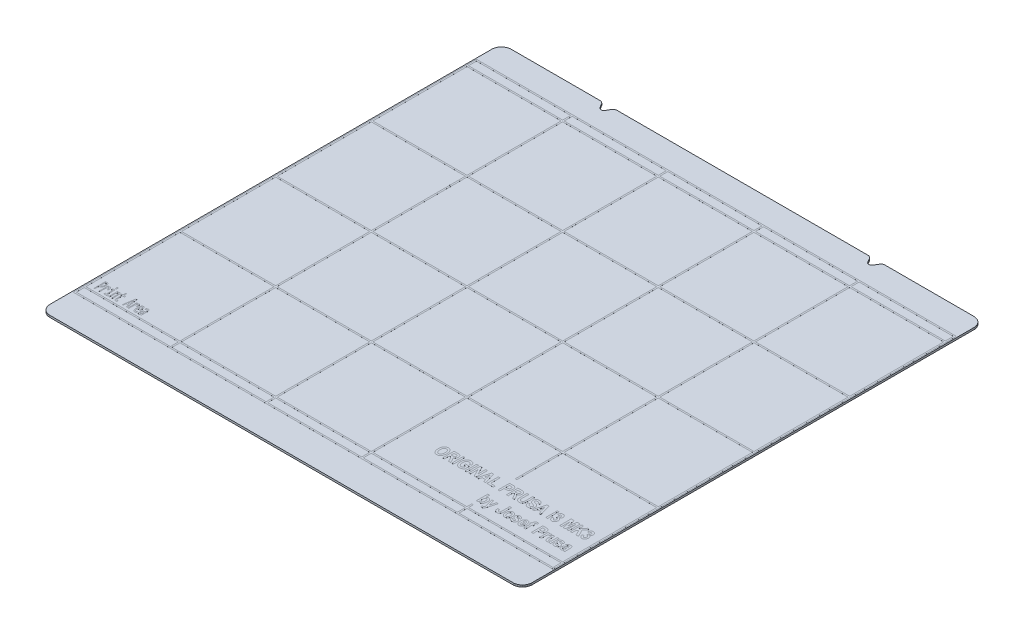
from build123d import *

# Parameters (mm, degrees)
BOSS_EXTRUDE2_DEPTH = 1
SKETCH6_W           = 49.199646
SKETCH6_H           = 4.2023014
SKETCH6_H_2         = 49.199519
SKETCH6_H_3         = 49.197868
SKETCH6_W_2         = 49.199138
SKETCH6_W_3         = 49.200916
SKETCH6_H_4         = 49.201932
SKETCH6_H_5         = 49.198122
BOSS_EXTRUDE5_DEPTH = 0.01
SKETCH7_W           = 0.923076923
SKETCH7_H           = 1
SKETCH7_H_2         = 4.384615384
SKETCH7_H_3         = 6
BOSS_EXTRUDE6_DEPTH = 0.01


with BuildPart() as part:
    # Sketch4 → Boss-Extrude2 (new body)
    with BuildSketch(Plane(origin=(0, 0, 0), x_dir=(1, 0, 0), z_dir=(0, 1, 0))):
        Polygon((0.146072352, 5.1442112), (0.146072352, 4.8934116), (0.246668798, 4.1382696), (0.53881274, 3.1998158), (0.99907852, 2.34955588), (1.60954974, 1.60954974), (2.34955588, 0.99907852), (3.1984188, 0.53881274), (4.1368726, 0.246668798), (4.8934116, 0.144693894), (5.1455828, 0.144693894), (247.145556, 0.144693894), (247.396254, 0.144693894), (248.153174, 0.246668798), (249.09145, 0.53881274), (249.940318, 0.99907852), (250.680474, 1.60954974), (251.290582, 2.34955588), (251.751084, 3.1998158), (252.043184, 4.1382696), (252.145038, 4.8934116), (252.145038, 5.1442112), (252.145038, 236.144816), (252.145038, 236.624368), (251.7648, 238.05896), (250.915932, 239.446562), (250.681744, 239.68075), (250.446032, 239.916462), (249.058176, 240.765076), (247.623838, 241.145822), (247.145556, 241.145822), (200.533254, 241.145822), (200.286874, 241.145822), (199.547988, 240.888012), (198.910194, 240.32845), (198.820532, 240.178082), (197.43039, 237.871254), (197.330822, 237.707424), (196.855588, 237.323122), (196.127878, 237.145322), (195.402962, 237.339378), (194.937126, 237.736126), (194.843654, 237.901734), (193.566034, 240.136934), (193.476626, 240.29289), (192.83299, 240.875566), (192.080388, 241.145822), (191.829944, 241.145822), (60.461398, 241.145822), (60.209176, 241.145822), (59.456828, 240.875566), (58.813446, 240.29289), (58.725054, 240.136934), (57.447688, 237.901734), (57.352438, 237.736126), (56.886856, 237.339378), (56.16194, 237.145322), (55.434484, 237.323122), (54.958996, 237.708694), (54.861206, 237.871254), (53.470556, 240.178082), (53.379878, 240.32845), (52.741576, 240.888012), (52.002944, 241.145822), (51.757834, 241.145822), (5.1455828, 241.145822), (4.6660562, 241.145822), (3.2314896, 240.765076), (1.84381394, 239.916462), (1.60954974, 239.68075), (1.375283, 239.446562), (0.52641246, 238.05896), (0.146072352, 236.624368), (0.146072352, 236.144816), align=None)
    extrude(amount=BOSS_EXTRUDE2_DEPTH)

    # Sketch6 → Boss-Extrude5 (add)
    with BuildSketch(Plane(origin=(0, 1, 1), x_dir=(1, 0, 0), z_dir=(0, 1, 0))):
        Polygon((251.547323097, 228.507748374), (0.742398194, 228.508767626), (0.73963704, 18.308174854), (0.73963704, 17.7042076), (1.14239294, 17.7042076), (251.548852903, 17.7042076), align=None)
        Polygon((1.539639615, 18.5042076), (1.539694816, 22.706509), (50.748488, 22.706509), (50.748488, 18.5042076), align=None, mode=Mode.SUBTRACT)
        Polygon((50.748488, 72.706028), (50.748488, 23.506509), (1.539705324, 23.506509), (1.5403516, 72.706028), align=None, mode=Mode.SUBTRACT)
        with Locations((76.148311, 20.6053583)):
            Rectangle(SKETCH6_W, SKETCH6_H, mode=Mode.SUBTRACT)
        with Locations((76.148311, 48.1062685)):
            Rectangle(SKETCH6_W, SKETCH6_H_2, mode=Mode.SUBTRACT)
        Polygon((1.540362108, 73.506028), (1.541008362, 122.703896), (50.748488, 122.703896), (50.748488, 73.506028), align=None, mode=Mode.SUBTRACT)
        with Locations((76.148311, 98.104962)):
            Rectangle(SKETCH6_W, SKETCH6_H_3, mode=Mode.SUBTRACT)
        with Locations((126.147703, 20.6053583)):
            Rectangle(SKETCH6_W_2, SKETCH6_H, mode=Mode.SUBTRACT)
        with Locations((176.14773, 20.6053583)):
            Rectangle(SKETCH6_W_3, SKETCH6_H, mode=Mode.SUBTRACT)
        with Locations((126.147703, 48.1062685)):
            Rectangle(SKETCH6_W_2, SKETCH6_H_2, mode=Mode.SUBTRACT)
        Polygon((201.548188, 22.706509), (250.748816601, 22.706509), (250.748847097, 18.5042076), (201.548188, 18.5042076), align=None, mode=Mode.SUBTRACT)
        Polygon((200.748188, 72.706028), (200.748188, 48.797065791), (201.548188, 48.797065791), (201.548188, 72.706028), (250.748453753, 72.706028), (250.748810795, 23.506509), (201.548188, 23.506509), (201.548188, 26.006509), (200.748188, 26.006509), (200.748188, 23.506509), (151.547272, 23.506509), (151.547272, 72.706028), align=None, mode=Mode.SUBTRACT)
        with Locations((126.147703, 98.104962)):
            Rectangle(SKETCH6_W_2, SKETCH6_H_3, mode=Mode.SUBTRACT)
        with Locations((176.14773, 98.104962)):
            Rectangle(SKETCH6_W_3, SKETCH6_H_3, mode=Mode.SUBTRACT)
        Polygon((250.748090918, 122.703896), (250.748447948, 73.506028), (201.548188, 73.506028), (201.548188, 122.703896), align=None, mode=Mode.SUBTRACT)
        Polygon((50.748488, 123.503896), (1.541018871, 123.503896), (1.541665178, 172.705828), (50.748488, 172.705828), align=None, mode=Mode.SUBTRACT)
        with Locations((76.148311, 148.104862)):
            Rectangle(SKETCH6_W, SKETCH6_H_4, mode=Mode.SUBTRACT)
        Polygon((50.748488, 222.70395), (50.748488, 173.505828), (1.541675686, 173.505828), (1.542321943, 222.70395), align=None, mode=Mode.SUBTRACT)
        Polygon((1.542332452, 223.50395), (1.542387686, 227.708764374), (50.748488, 227.708564405), (50.748488, 223.50395), align=None, mode=Mode.SUBTRACT)
        with Locations((76.148311, 198.104889)):
            Rectangle(SKETCH6_W, SKETCH6_H_5, mode=Mode.SUBTRACT)
        Polygon((51.548488, 227.708561154), (100.748134, 227.70836121), (100.748134, 223.50395), (51.548488, 223.50395), align=None, mode=Mode.SUBTRACT)
        with Locations((126.147703, 148.104862)):
            Rectangle(SKETCH6_W_2, SKETCH6_H_4, mode=Mode.SUBTRACT)
        with Locations((176.14773, 148.104862)):
            Rectangle(SKETCH6_W_3, SKETCH6_H_4, mode=Mode.SUBTRACT)
        Polygon((201.548188, 172.705828), (250.747728053, 172.705828), (250.748085112, 123.503896), (201.548188, 123.503896), align=None, mode=Mode.SUBTRACT)
        with Locations((126.147703, 198.104889)):
            Rectangle(SKETCH6_W_2, SKETCH6_H_5, mode=Mode.SUBTRACT)
        with Locations((176.14773, 198.104889)):
            Rectangle(SKETCH6_W_3, SKETCH6_H_5, mode=Mode.SUBTRACT)
        Polygon((101.548134, 223.50395), (101.548134, 227.708357959), (150.747272, 227.708158018), (150.747272, 223.50395), align=None, mode=Mode.SUBTRACT)
        Polygon((151.547272, 227.708154767), (200.748188, 227.707954818), (200.748188, 223.50395), (151.547272, 223.50395), align=None, mode=Mode.SUBTRACT)
        Polygon((201.548188, 222.70395), (250.747365215, 222.70395), (250.747722247, 173.505828), (201.548188, 173.505828), align=None, mode=Mode.SUBTRACT)
        Polygon((201.548188, 227.707951567), (250.747328903, 227.707751626), (250.74735941, 223.50395), (201.548188, 223.50395), align=None, mode=Mode.SUBTRACT)
    extrude(amount=BOSS_EXTRUDE5_DEPTH)

    # Sketch7 → Boss-Extrude6 (add)
    # profile 1 of 41: a face of its own
    with BuildSketch(Plane(origin=(0, 1, 0), x_dir=(1, 0, 0), z_dir=(0, 1, 0))):
        with BuildLine():
            add(Edge.make_bspline(
                [(6.353598406, 28.092011915), (6.350728616, 27.969852773), (6.34499508, 27.725791698), (6.299510943, 27.424697572), (6.250091609, 27.190567049), (6.202384401, 27.02419746), (6.145358132, 26.867257704), (6.078790016, 26.720239783), (6.003752554, 26.584096475), (5.916838036, 26.462001376), (5.821640604, 26.352012068), (5.715729363, 26.256813433), (5.600071404, 26.176810747), (5.471056651, 26.123223339), (5.332706455, 26.086715994), (5.236187843, 26.08332735), (5.186516112, 26.08158344)],
                knots=[0, 0, 0, 0, 1.996022077, 3.987841489, 4.966357093, 5.907196832, 6.814740836, 7.69386705, 8.543463975, 9.351763436, 10.139753214, 10.916646958, 11.675290293, 12.425740892, 13.189833206, 14, 14, 14, 14], degree=3))
            Line((5.186516112, 26.08158344), (4.821972924, 26.08158344))
            Line((4.821972924, 26.08158344), (4.821972924, 23.92833021))
            Line((4.821972924, 23.92833021), (4.420703371, 23.92833021))
            Line((4.420703371, 23.92833021), (4.420703371, 29.92833021))
            Line((4.420703371, 29.92833021), (5.249086957, 29.92833021))
            add(Edge.make_bspline(
                [(5.249086957, 29.92833021), (5.28541744, 29.926793823), (5.357588814, 29.923741753), (5.464729104, 29.906203763), (5.568578719, 29.874197194), (5.670164426, 29.830500276), (5.767828244, 29.773544823), (5.861114156, 29.702147839), (5.944227788, 29.612107913), (6.024449154, 29.509696474), (6.096023218, 29.390114484), (6.16151751, 29.255711284), (6.216694075, 29.103995926), (6.265772068, 28.937013595), (6.305299481, 28.752037486), (6.33302957, 28.54882525), (6.351199251, 28.326755319), (6.352777787, 28.172304711), (6.353598406, 28.092011915)],
                knots=[0, 0, 0, 0, 0.729261287, 1.448695037, 2.171114003, 2.90461933, 3.662981216, 4.434597926, 5.25185079, 6.114436549, 7.041273685, 8.04226196, 9.110300587, 10.276302553, 11.532553459, 12.901555156, 14.389240392, 16, 16, 16, 16], degree=3))
        make_face()
        with BuildLine():
            add(Edge.make_bspline(
                [(5.936006023, 28.055285549), (5.935693208, 28.102011981), (5.935085088, 28.192849038), (5.924385817, 28.324796276), (5.912076431, 28.448510095), (5.891556056, 28.564006928), (5.86400955, 28.670435289), (5.833887005, 28.769414036), (5.794657184, 28.858500986), (5.752093503, 28.940166543), (5.702851149, 29.012400319), (5.649722362, 29.075548495), (5.592140353, 29.129579163), (5.528952382, 29.173679757), (5.460862422, 29.207211215), (5.388956924, 29.232920266), (5.311664388, 29.245884336), (5.258647803, 29.248320615), (5.231403892, 29.249572558)],
                knots=[0, 0, 0, 0, 1.447568133, 2.814099442, 4.100475215, 5.299464901, 6.444547122, 7.506614437, 8.501093049, 9.456588986, 10.356866727, 11.204272819, 12.0096283, 12.797008983, 13.582506728, 14.355717449, 15.155043906, 16, 16, 16, 16], degree=3))
            Line((5.231403892, 29.249572558), (4.821972924, 29.249572558))
            Line((4.821972924, 29.249572558), (4.821972924, 26.779384392))
            Line((4.821972924, 26.779384392), (5.194677526, 26.779384392))
            add(Edge.make_bspline(
                [(5.194677526, 26.779384392), (5.223766501, 26.780441627), (5.280080841, 26.782488364), (5.3619084, 26.798039438), (5.438594111, 26.822762279), (5.511355879, 26.856056605), (5.577166925, 26.902596868), (5.638726211, 26.956969978), (5.695127708, 27.021777214), (5.745090516, 27.097085945), (5.790003382, 27.181901662), (5.829502412, 27.276609877), (5.863551676, 27.381590668), (5.890322056, 27.497227855), (5.910240307, 27.622750542), (5.925019446, 27.758023143), (5.934935546, 27.903245375), (5.935641972, 28.003579262), (5.936006023, 28.055285549)],
                knots=[0, 0, 0, 0, 0.84367321, 1.633295792, 2.407197411, 3.178185824, 3.944557835, 4.73669741, 5.557280393, 6.429403377, 7.353469956, 8.338204693, 9.403330541, 10.552191919, 11.778593225, 13.089124282, 14.499902864, 16, 16, 16, 16], degree=3))
        make_face(mode=Mode.SUBTRACT)
    # profile 2 of 41: a face of its own
    with BuildSketch(Plane(origin=(0, 1, 0), x_dir=(1, 0, 0), z_dir=(0, 1, 0))):
        with BuildLine():
            Line((7.041877708, 28.538169248), (7.399619716, 28.538169248))
            Line((7.399619716, 28.538169248), (7.411861838, 27.68802189))
            add(Edge.make_bspline(
                [(7.411861838, 27.68802189), (7.443915535, 27.764676686), (7.504064751, 27.908520497), (7.60406439, 28.103422891), (7.699920066, 28.266843558), (7.798931197, 28.395921798), (7.897630027, 28.494778129), (7.995938858, 28.566390226), (8.096979338, 28.611405675), (8.165939762, 28.617044331), (8.199438352, 28.619783395)],
                knots=[0, 0, 0, 0, 1.556511302, 2.920815482, 4.102688906, 5.102101432, 5.961348895, 6.711097918, 7.373895939, 8, 8, 8, 8], degree=3))
            add(Edge.make_bspline(
                [(8.199438352, 28.619783395), (8.228146175, 28.6186323), (8.284622843, 28.616367762), (8.366455103, 28.593644763), (8.442089686, 28.55610713), (8.512708474, 28.504878121), (8.577009092, 28.438309485), (8.63512577, 28.357236522), (8.688470092, 28.262368656), (8.735421455, 28.153170297), (8.777567675, 28.029922445), (8.814018659, 27.892696333), (8.843656927, 27.741357465), (8.866276379, 27.575982391), (8.883634514, 27.396735059), (8.896051741, 27.2034936), (8.901048187, 26.996141338), (8.900330887, 26.853291282), (8.899959775, 26.779384392)],
                knots=[0, 0, 0, 0, 0.639805592, 1.258684312, 1.878969107, 2.516849502, 3.196955599, 3.936063093, 4.738466875, 5.622490609, 6.58616888, 7.64457924, 8.790181317, 10.027193296, 11.370001396, 12.810466998, 14.349818912, 16, 16, 16, 16], degree=3))
            Line((8.899959775, 26.779384392), (8.504131165, 26.779384392))
            add(Edge.make_bspline(
                [(8.504131165, 26.779384392), (8.504272485, 26.827896867), (8.504545907, 26.92175717), (8.502647681, 27.057432904), (8.494564013, 27.182931615), (8.488449836, 27.298468555), (8.47336743, 27.402971467), (8.459596214, 27.497702255), (8.440467171, 27.581695492), (8.4129739, 27.675547922), (8.373201693, 27.77314457), (8.309802091, 27.862562601), (8.231421786, 27.920675514), (8.17259827, 27.927934233), (8.143668685, 27.931504093)],
                knots=[0, 0, 0, 0, 1.34446153, 2.601218908, 3.758910473, 4.82959819, 5.805232903, 6.683170181, 7.481817953, 8.189488615, 9.393900675, 10.381517669, 11.20402545, 12, 12, 12, 12], degree=3))
            add(Edge.make_bspline(
                [(8.143668685, 27.931504093), (8.116847013, 27.928735072), (8.059437818, 27.922808249), (7.976785885, 27.873118211), (7.894294337, 27.795648185), (7.811944212, 27.683233181), (7.725882508, 27.537673097), (7.651967134, 27.394026546), (7.591089442, 27.260351412), (7.540503063, 27.146377417), (7.489220912, 27.021484919), (7.455255309, 26.934503918), (7.437706318, 26.88956349)],
                knots=[0, 0, 0, 0, 0.612007176, 1.309942164, 2.156312657, 3.20242731, 4.489985833, 6.034003172, 6.904059984, 7.858508545, 8.893556739, 10, 10, 10, 10], degree=3))
            Line((7.437706318, 26.88956349), (7.437706318, 23.92833021))
            Line((7.437706318, 23.92833021), (7.041877708, 23.92833021))
            Line((7.041877708, 23.92833021), (7.041877708, 28.538169248))
        make_face()
    # profile 3 of 41: a face of its own
    with BuildSketch(Plane(origin=(0, 1, 0), x_dir=(1, 0, 0), z_dir=(0, 1, 0))):
        Polygon((10.24387272, 27.877094662), (9.575996955, 27.877094662), (9.575996955, 28.538169248), (10.641061566, 28.538169248), (10.641061566, 24.593485503), (11.314378275, 24.593485503), (11.314378275, 23.92833021), (9.501183988, 23.92833021), (9.501183988, 24.593485503), (10.24387272, 24.593485503), align=None)
    # profile 4 of 41: a face of its own
    with BuildSketch(Plane(origin=(0, 1, 0), x_dir=(1, 0, 0), z_dir=(0, 1, 0))):
        with BuildLine():
            add(Edge.make_bspline(
                [(10.381256533, 30.469704048), (10.403090983, 30.467224505), (10.447852853, 30.462141301), (10.508297646, 30.422106199), (10.562184633, 30.36361749), (10.604469235, 30.283425158), (10.643211211, 30.190502307), (10.668912754, 30.083511236), (10.687770406, 29.966173041), (10.68925738, 29.883983284), (10.690030054, 29.84127512)],
                knots=[0, 0, 0, 0, 0.685833263, 1.405997407, 2.227423493, 3.18379615, 4.25101031, 5.405054148, 6.651591424, 8, 8, 8, 8], degree=3))
            add(Edge.make_bspline(
                [(10.690030054, 29.84127512), (10.689194692, 29.799479881), (10.687561352, 29.717759796), (10.668890632, 29.600408155), (10.643345223, 29.492509041), (10.604966555, 29.399251756), (10.561287102, 29.32007848), (10.508809621, 29.260438906), (10.447802869, 29.220452161), (10.403074595, 29.215339906), (10.381256533, 29.212846192)],
                knots=[0, 0, 0, 0, 1.320175266, 2.581270918, 3.749560236, 4.817100935, 5.761332336, 6.593572395, 7.31395689, 8, 8, 8, 8], degree=3))
            add(Edge.make_bspline(
                [(10.381256533, 29.212846192), (10.359935643, 29.215428858), (10.315757658, 29.220780275), (10.254983341, 29.25998923), (10.204382535, 29.321027547), (10.15808279, 29.398379101), (10.122862778, 29.493181846), (10.094303584, 29.600075707), (10.076501317, 29.717819498), (10.074742688, 29.799500083), (10.073843249, 29.84127512)],
                knots=[0, 0, 0, 0, 0.673490296, 1.395506601, 2.220047457, 3.173698022, 4.238337304, 5.412882004, 6.676834282, 8, 8, 8, 8], degree=3))
            add(Edge.make_bspline(
                [(10.073843249, 29.84127512), (10.074682637, 29.883962158), (10.076298, 29.966111257), (10.094287724, 30.083844121), (10.122990063, 30.189831334), (10.158569203, 30.284296807), (10.2034798, 30.36266668), (10.255501535, 30.422559973), (10.31570843, 30.461811588), (10.359919618, 30.467134931), (10.381256533, 30.469704048)],
                knots=[0, 0, 0, 0, 1.351491649, 2.600879073, 3.761212816, 4.825549023, 5.791292717, 6.604890664, 7.32670143, 8, 8, 8, 8], degree=3))
        make_face()
    # profile 5 of 41: a face of its own
    with BuildSketch(Plane(origin=(0, 1, 0), x_dir=(1, 0, 0), z_dir=(0, 1, 0))):
        with BuildLine():
            Line((11.998576869, 28.538169248), (12.348157463, 28.538169248))
            Line((12.348157463, 28.538169248), (12.363120056, 27.79412028))
            add(Edge.make_bspline(
                [(12.363120056, 27.79412028), (12.394806969, 27.867115172), (12.45323364, 28.001708549), (12.547876691, 28.182117923), (12.638393348, 28.328289382), (12.728386901, 28.442961873), (12.820012186, 28.527204686), (12.914397979, 28.582669673), (13.011236703, 28.614584079), (13.077017788, 28.618050952), (13.109889497, 28.619783395)],
                knots=[0, 0, 0, 0, 1.620070432, 2.987205607, 4.145093993, 5.117038011, 5.947498143, 6.663326019, 7.332045718, 8, 8, 8, 8], degree=3))
            add(Edge.make_bspline(
                [(13.109889497, 28.619783395), (13.138115494, 28.618439152), (13.193416894, 28.615805462), (13.273982054, 28.596015111), (13.349463386, 28.563615332), (13.41862542, 28.515498864), (13.482635151, 28.455717783), (13.54012947, 28.381661159), (13.592918123, 28.295897944), (13.640656516, 28.196980976), (13.682392401, 28.084857989), (13.719162744, 27.959931043), (13.747988517, 27.821423069), (13.774744919, 27.670554405), (13.792280298, 27.505510556), (13.808152593, 27.327374421), (13.815605746, 27.135829289), (13.816665863, 27.00382702), (13.817212099, 26.935811506)],
                knots=[0, 0, 0, 0, 0.675902241, 1.324252249, 1.976325045, 2.633358699, 3.332953848, 4.067780876, 4.872919561, 5.742840245, 6.695431209, 7.737300294, 8.860538287, 10.084247969, 11.407850442, 12.836354643, 14.369899498, 16, 16, 16, 16], degree=3))
            Line((13.817212099, 26.935811506), (13.817212099, 23.92833021))
            Line((13.817212099, 23.92833021), (13.42410396, 23.92833021))
            Line((13.42410396, 23.92833021), (13.42410396, 26.870520189))
            add(Edge.make_bspline(
                [(13.42410396, 26.870520189), (13.422689071, 26.954884726), (13.420045924, 27.112485691), (13.403957568, 27.331296195), (13.374004497, 27.515280069), (13.330825712, 27.664188249), (13.278809062, 27.782802782), (13.208992319, 27.866734656), (13.12553984, 27.92282862), (13.062630605, 27.928601247), (13.030995822, 27.931504093)],
                knots=[0, 0, 0, 0, 1.646828721, 3.076432436, 4.279772443, 5.276726657, 6.100176692, 6.784664205, 7.388851498, 8, 8, 8, 8], degree=3))
            add(Edge.make_bspline(
                [(13.030995822, 27.931504093), (13.007113239, 27.929195649), (12.957232942, 27.924374316), (12.883217899, 27.888759153), (12.811797487, 27.823695205), (12.738840221, 27.728719885), (12.661546554, 27.599384345), (12.595150156, 27.468132386), (12.537899307, 27.343676874), (12.492395247, 27.234132823), (12.441252786, 27.114502819), (12.407807155, 27.030204073), (12.390324772, 26.98614023)],
                knots=[0, 0, 0, 0, 0.601107724, 1.255451818, 2.02503161, 3.017130442, 4.263383531, 5.816768122, 6.721681293, 7.714832192, 8.805518724, 10, 10, 10, 10], degree=3))
            Line((12.390324772, 26.98614023), (12.390324772, 23.92833021))
            Line((12.390324772, 23.92833021), (11.998576869, 23.92833021))
            Line((11.998576869, 23.92833021), (11.998576869, 28.538169248))
        make_face()
    # profile 6 of 41: a face of its own
    with BuildSketch(Plane(origin=(0, 1, 0), x_dir=(1, 0, 0), z_dir=(0, 1, 0))):
        with BuildLine():
            add(Edge.make_bspline(
                [(16.345890403, 23.992261291), (16.301516741, 23.971428773), (16.213151955, 23.929943331), (16.071983174, 23.891702603), (15.928097042, 23.869757588), (15.831345373, 23.866190609), (15.782752793, 23.864399128)],
                knots=[0, 0, 0, 0, 1.007986272, 2.007282846, 2.999177283, 4, 4, 4, 4], degree=3))
            add(Edge.make_bspline(
                [(15.782752793, 23.864399128), (15.748241871, 23.8659162), (15.681025207, 23.868870989), (15.583427282, 23.885701497), (15.493971997, 23.918573757), (15.409493172, 23.960050021), (15.33359084, 24.017123972), (15.262641287, 24.084344179), (15.200881459, 24.165454184), (15.144208122, 24.257670862), (15.095443477, 24.363267135), (15.05426535, 24.482050901), (15.016599819, 24.612969926), (14.989493164, 24.757962584), (14.965896316, 24.915336096), (14.950587471, 25.086122709), (14.938680483, 25.269355666), (14.938262129, 25.396002307), (14.938046377, 25.461315927)],
                knots=[0, 0, 0, 0, 0.819842472, 1.596801008, 2.338979849, 3.075517047, 3.82259738, 4.583888605, 5.38918663, 6.234702109, 7.149653256, 8.143806871, 9.217255769, 10.380429594, 11.64240634, 12.994108653, 14.44981562, 16, 16, 16, 16], degree=3))
            Line((14.938046377, 25.461315927), (14.938046377, 27.867573012))
            Line((14.938046377, 27.867573012), (14.304176506, 27.867573012))
            Line((14.304176506, 27.867573012), (14.304176506, 28.538169248))
            Line((14.304176506, 28.538169248), (14.938046377, 28.538169248))
            Line((14.938046377, 28.538169248), (14.938046377, 29.804548754))
            Line((14.938046377, 29.804548754), (15.32979428, 30.011304592))
            Line((15.32979428, 30.011304592), (15.32979428, 28.538169248))
            Line((15.32979428, 28.538169248), (16.345890403, 28.538169248))
            Line((16.345890403, 28.538169248), (16.345890403, 27.867573012))
            Line((16.345890403, 27.867573012), (15.32979428, 27.867573012))
            Line((15.32979428, 27.867573012), (15.32979428, 25.526607244))
            add(Edge.make_bspline(
                [(15.32979428, 25.526607244), (15.331068648, 25.448983043), (15.333453422, 25.303721887), (15.358074676, 25.101582314), (15.394963989, 24.929120793), (15.451915463, 24.78817432), (15.523794236, 24.675774534), (15.615462867, 24.596462997), (15.723307888, 24.546423326), (15.801257318, 24.541567142), (15.841242931, 24.539076072)],
                knots=[0, 0, 0, 0, 1.503059969, 2.812734001, 3.939949827, 4.908947251, 5.744622062, 6.498292414, 7.229671099, 8, 8, 8, 8], degree=3))
            add(Edge.make_bspline(
                [(15.841242931, 24.539076072), (15.879004508, 24.540728127), (15.958505954, 24.544206286), (16.081795387, 24.572234475), (16.213522698, 24.616497113), (16.300555037, 24.659500339), (16.345890403, 24.681900829)],
                knots=[0, 0, 0, 0, 0.855565112, 1.801266498, 2.854674134, 4, 4, 4, 4], degree=3))
            Line((16.345890403, 24.681900829), (16.345890403, 23.992261291))
        make_face()
    # profile 7 of 41: a face of its own
    with BuildSketch(Plane(origin=(0, 1, 0), x_dir=(1, 0, 0), z_dir=(0, 1, 0))):
        Polygon((21.72562289, 23.92833021), (21.288987207, 23.92833021), (21.083591605, 25.236877025), (19.858019172, 25.236877025), (19.651263335, 23.92833021), (19.235031188, 23.92833021), (20.211680474, 29.92833021), (20.762575962, 29.92833021), align=None)
        Polygon((20.9693318, 25.967323635), (20.471485507, 29.176119827), (19.973639213, 25.967323635), align=None, mode=Mode.SUBTRACT)
    # profile 8 of 41: a face of its own
    with BuildSketch(Plane(origin=(0, 1, 0), x_dir=(1, 0, 0), z_dir=(0, 1, 0))):
        with BuildLine():
            Line((22.189463289, 28.538169248), (22.547205298, 28.538169248))
            Line((22.547205298, 28.538169248), (22.55944742, 27.68802189))
            add(Edge.make_bspline(
                [(22.55944742, 27.68802189), (22.591501117, 27.764676686), (22.651650333, 27.908520497), (22.751649972, 28.103422891), (22.847505648, 28.266843558), (22.946516779, 28.395921798), (23.045215608, 28.494778129), (23.14352444, 28.566390226), (23.244564919, 28.611405675), (23.313525344, 28.617044331), (23.347023933, 28.619783395)],
                knots=[0, 0, 0, 0, 1.556511302, 2.920815482, 4.102688906, 5.102101432, 5.961348895, 6.711097918, 7.373895939, 8, 8, 8, 8], degree=3))
            add(Edge.make_bspline(
                [(23.347023933, 28.619783395), (23.375731757, 28.6186323), (23.432208424, 28.616367762), (23.514040684, 28.593644763), (23.589675267, 28.55610713), (23.660294056, 28.504878121), (23.724594673, 28.438309485), (23.782711351, 28.357236522), (23.836055674, 28.262368656), (23.883007036, 28.153170297), (23.925153257, 28.029922445), (23.961604241, 27.892696333), (23.991242508, 27.741357465), (24.01386196, 27.575982391), (24.031220096, 27.396735059), (24.043637323, 27.2034936), (24.048633769, 26.996141338), (24.047916469, 26.853291282), (24.047545357, 26.779384392)],
                knots=[0, 0, 0, 0, 0.639805592, 1.258684312, 1.878969107, 2.516849502, 3.196955599, 3.936063093, 4.738466875, 5.622490609, 6.58616888, 7.64457924, 8.790181317, 10.027193296, 11.370001396, 12.810466998, 14.349818912, 16, 16, 16, 16], degree=3))
            Line((24.047545357, 26.779384392), (23.651716747, 26.779384392))
            add(Edge.make_bspline(
                [(23.651716747, 26.779384392), (23.651858067, 26.827896867), (23.652131488, 26.92175717), (23.650233262, 27.057432904), (23.642149595, 27.182931615), (23.636035418, 27.298468555), (23.620953011, 27.402971467), (23.607181796, 27.497702255), (23.588052753, 27.581695492), (23.560559481, 27.675547922), (23.520787275, 27.77314457), (23.457387673, 27.862562601), (23.379007367, 27.920675514), (23.320183851, 27.927934233), (23.291254266, 27.931504093)],
                knots=[0, 0, 0, 0, 1.34446153, 2.601218908, 3.758910473, 4.82959819, 5.805232903, 6.683170181, 7.481817953, 8.189488615, 9.393900675, 10.381517669, 11.20402545, 12, 12, 12, 12], degree=3))
            add(Edge.make_bspline(
                [(23.291254266, 27.931504093), (23.264432594, 27.928735072), (23.2070234, 27.922808249), (23.124371467, 27.873118211), (23.041879919, 27.795648185), (22.959529794, 27.683233181), (22.873468089, 27.537673097), (22.799552716, 27.394026546), (22.738675024, 27.260351412), (22.688088645, 27.146377417), (22.636806494, 27.021484919), (22.60284089, 26.934503918), (22.5852919, 26.88956349)],
                knots=[0, 0, 0, 0, 0.612007176, 1.309942164, 2.156312657, 3.20242731, 4.489985833, 6.034003172, 6.904059984, 7.858508545, 8.893556739, 10, 10, 10, 10], degree=3))
            Line((22.5852919, 26.88956349), (22.5852919, 23.92833021))
            Line((22.5852919, 23.92833021), (22.189463289, 23.92833021))
            Line((22.189463289, 23.92833021), (22.189463289, 28.538169248))
        make_face()
    # profile 9 of 41: a face of its own
    with BuildSketch(Plane(origin=(0, 1, 0), x_dir=(1, 0, 0), z_dir=(0, 1, 0))):
        with BuildLine():
            add(Edge.make_bspline(
                [(26.532696116, 26.476051815), (26.533024848, 26.423905768), (26.533622342, 26.329126351), (26.529917832, 26.197204192), (26.527757339, 26.082460499), (26.524669965, 26.010393648), (26.523174466, 25.97548505)],
                knots=[0, 0, 0, 0, 1.249646567, 2.27132798, 3.162645311, 4, 4, 4, 4], degree=3))
            Line((26.523174466, 25.97548505), (24.934419082, 25.97548505))
            add(Edge.make_bspline(
                [(24.934419082, 25.97548505), (24.934756641, 25.918336004), (24.935410844, 25.807579086), (24.945707939, 25.646550571), (24.959591351, 25.495225668), (24.982336605, 25.35435694), (25.006434625, 25.222879936), (25.041351688, 25.102808816), (25.080690222, 24.992381337), (25.124305469, 24.891236772), (25.177131713, 24.803018348), (25.231526314, 24.723785177), (25.295583979, 24.659992872), (25.362769718, 24.605275886), (25.436347423, 24.563242224), (25.515125765, 24.532744301), (25.599191279, 24.514516047), (25.657066812, 24.512765521), (25.686629465, 24.511871357)],
                knots=[0, 0, 0, 0, 1.502258419, 2.911431139, 4.24116429, 5.495553865, 6.662186554, 7.75276317, 8.77840078, 9.744311004, 10.641889886, 11.478923419, 12.262916904, 13.009491473, 13.751770685, 14.480134551, 15.223657193, 16, 16, 16, 16], degree=3))
            add(Edge.make_bspline(
                [(25.686629465, 24.511871357), (25.71975075, 24.512794253), (25.786163516, 24.514644788), (25.885425506, 24.525338027), (25.982462081, 24.544800343), (26.076993897, 24.569180067), (26.167030606, 24.599260561), (26.253492005, 24.631826226), (26.334509656, 24.667908547), (26.385500344, 24.695634496), (26.410274897, 24.709105544)],
                knots=[0, 0, 0, 0, 1.049236985, 2.103865516, 3.157222172, 4.181292504, 5.194022179, 6.162191351, 7.107074489, 8, 8, 8, 8], degree=3))
            Line((26.410274897, 24.709105544), (26.410274897, 24.052111665))
            add(Edge.make_bspline(
                [(26.410274897, 24.052111665), (26.354216442, 24.023059255), (26.237995938, 23.962827738), (26.0474181, 23.897987669), (25.842712204, 23.854301866), (25.70181575, 23.848352134), (25.630859798, 23.845355828)],
                knots=[0, 0, 0, 0, 0.928972079, 1.925946818, 2.955499478, 4, 4, 4, 4], degree=3))
            add(Edge.make_bspline(
                [(25.630859798, 23.845355828), (25.583938833, 23.846796082), (25.492151595, 23.849613522), (25.360858368, 23.883029908), (25.237972704, 23.931371611), (25.127204793, 24.004107837), (25.025909684, 24.094433385), (24.93541045, 24.204244679), (24.854338831, 24.331009309), (24.782069657, 24.475099392), (24.719448349, 24.636821174), (24.667842309, 24.816068505), (24.622436434, 25.012159439), (24.586795118, 25.22482915), (24.557680147, 25.45393227), (24.540221011, 25.697792732), (24.526973481, 25.956297248), (24.52566312, 26.133253037), (24.524988114, 26.224408197)],
                knots=[0, 0, 0, 0, 0.773996467, 1.514099258, 2.226928218, 2.948573592, 3.691972733, 4.463751076, 5.293509055, 6.175319027, 7.124837246, 8.156762938, 9.257044427, 10.451389484, 11.720726934, 13.074304896, 14.492887939, 16, 16, 16, 16], degree=3))
            add(Edge.make_bspline(
                [(24.524988114, 26.224408197), (24.52559181, 26.304234322), (24.526786392, 26.46219273), (24.541692009, 26.695292386), (24.560920495, 26.922353873), (24.59136121, 27.141426956), (24.627854597, 27.351588953), (24.676850725, 27.548418111), (24.728121483, 27.733310739), (24.79170267, 27.903096824), (24.859392127, 28.059642384), (24.937065144, 28.198966367), (25.021921913, 28.320981795), (25.11214106, 28.427061522), (25.211676593, 28.512488767), (25.318505436, 28.575404091), (25.433503778, 28.612586191), (25.512260617, 28.617371079), (25.551966123, 28.619783395)],
                knots=[0, 0, 0, 0, 1.359688008, 2.690524584, 3.97799558, 5.240830982, 6.457487946, 7.609689681, 8.695122836, 9.723974027, 10.695711829, 11.598274904, 12.436111802, 13.224528282, 13.964336606, 14.659916736, 15.324392854, 16, 16, 16, 16], degree=3))
            add(Edge.make_bspline(
                [(25.551966123, 28.619783395), (25.590724697, 28.618121847), (25.666631182, 28.6148678), (25.776205046, 28.584028718), (25.880021815, 28.538572499), (25.974001899, 28.469630515), (26.06152602, 28.385418247), (26.143780035, 28.286318506), (26.215106243, 28.168354126), (26.281706647, 28.037193466), (26.340092503, 27.889939228), (26.391320782, 27.728583055), (26.435047725, 27.551854521), (26.469168777, 27.36084962), (26.498132252, 27.156742273), (26.518033543, 26.940213141), (26.53049204, 26.711973952), (26.531950432, 26.555869158), (26.532696116, 26.476051815)],
                knots=[0, 0, 0, 0, 0.719076776, 1.40827135, 2.10255268, 2.816072058, 3.561505153, 4.358196363, 5.202746939, 6.118996043, 7.09125461, 8.144478012, 9.265064639, 10.473903692, 11.750915128, 13.097425775, 14.515895902, 16, 16, 16, 16], degree=3))
        make_face()
        with BuildLine():
            add(Edge.make_bspline(
                [(26.124625384, 26.591671856), (26.124951486, 26.689657078), (26.125576357, 26.877414472), (26.103669056, 27.10590962), (26.075379803, 27.273589495), (26.052226581, 27.388145355), (26.020039866, 27.493121399), (25.985122705, 27.589587901), (25.946460898, 27.677229709), (25.900942403, 27.753790381), (25.852022208, 27.821425793), (25.798089797, 27.878793605), (25.738958472, 27.924460089), (25.675372004, 27.958377768), (25.606118258, 27.977667826), (25.558426512, 27.980432984), (25.534283058, 27.981832817)],
                knots=[0, 0, 0, 0, 2.494531181, 4.779972566, 5.833596004, 6.825618413, 7.753606331, 8.62673329, 9.438114349, 10.188711062, 10.890841867, 11.560605088, 12.186525619, 12.785669088, 13.38525752, 14, 14, 14, 14], degree=3))
            add(Edge.make_bspline(
                [(25.534283058, 27.981832817), (25.513351422, 27.980229386), (25.471230654, 27.977002799), (25.408605775, 27.959849797), (25.351522871, 27.925019377), (25.296029612, 27.881639351), (25.246663755, 27.824501956), (25.198235581, 27.759184991), (25.155281782, 27.681895328), (25.114511002, 27.595213029), (25.078362919, 27.498603554), (25.04519806, 27.392907433), (25.017713931, 27.277663294), (24.981891917, 27.108892912), (24.950146935, 26.879226269), (24.939806575, 26.690172097), (24.934419082, 26.591671856)],
                knots=[0, 0, 0, 0, 0.541116297, 1.08888926, 1.654594509, 2.253646059, 2.899496856, 3.594214149, 4.348487816, 5.175084189, 6.063405717, 7.006610362, 8.030531922, 9.117681775, 11.456234264, 14, 14, 14, 14], degree=3))
            Line((24.934419082, 26.591671856), (26.124625384, 26.591671856))
        make_face(mode=Mode.SUBTRACT)
    # profile 10 of 41: a face of its own
    with BuildSketch(Plane(origin=(0, 1, 0), x_dir=(1, 0, 0), z_dir=(0, 1, 0))):
        with BuildLine():
            Line((28.598894257, 23.92833021), (28.590732843, 24.548597723))
            add(Edge.make_bspline(
                [(28.590732843, 24.548597723), (28.560750346, 24.490545851), (28.503918725, 24.380508919), (28.41071612, 24.232224743), (28.316463314, 24.109213698), (28.221406921, 24.010638411), (28.122966996, 23.937322791), (28.023722548, 23.883208449), (27.920100192, 23.852565595), (27.850036114, 23.847740979), (27.815398451, 23.845355828)],
                knots=[0, 0, 0, 0, 1.422849743, 2.697002081, 3.809277837, 4.79404517, 5.669136589, 6.47323619, 7.245211942, 8, 8, 8, 8], degree=3))
            add(Edge.make_bspline(
                [(27.815398451, 23.845355828), (27.78399859, 23.846632161), (27.723306738, 23.849099149), (27.635763145, 23.869096954), (27.555077563, 23.899893977), (27.481561065, 23.944359497), (27.416435701, 24.001286332), (27.356553872, 24.066466913), (27.30267603, 24.141329778), (27.238541702, 24.256135884), (27.17457863, 24.422725854), (27.121262767, 24.646343687), (27.091238382, 24.895553712), (27.087093207, 25.069489596), (27.084951841, 25.159343585)],
                knots=[0, 0, 0, 0, 0.675420159, 1.305499405, 1.923743331, 2.528188738, 3.144502456, 3.780229373, 4.430557273, 5.125659721, 6.606854016, 8.254939078, 10.065329262, 12, 12, 12, 12], degree=3))
            add(Edge.make_bspline(
                [(27.084951841, 25.159343585), (27.085638236, 25.215597464), (27.086974003, 25.32507083), (27.100096151, 25.484323979), (27.117695949, 25.634565157), (27.147194425, 25.774646501), (27.181588088, 25.905993767), (27.226079325, 26.027379196), (27.274936355, 26.141046824), (27.335893713, 26.243418747), (27.40267445, 26.336035581), (27.478871929, 26.415678702), (27.560738843, 26.484732659), (27.651134413, 26.541383446), (27.75036676, 26.582725986), (27.855810007, 26.615192537), (27.96947855, 26.632066328), (28.047499339, 26.635038102), (28.087445606, 26.636559636)],
                knots=[0, 0, 0, 0, 1.340666904, 2.609016889, 3.807561119, 4.943757174, 6.018771352, 7.041033571, 8.02325539, 8.96311234, 9.875404817, 10.739354763, 11.583538645, 12.423351902, 13.270643854, 14.139246521, 15.047303217, 16, 16, 16, 16], degree=3))
            Line((28.087445606, 26.636559636), (28.556726948, 26.636559636))
            Line((28.556726948, 26.636559636), (28.556726948, 27.040549661))
            add(Edge.make_bspline(
                [(28.556726948, 27.040549661), (28.555368388, 27.105483784), (28.552782888, 27.229061048), (28.528015966, 27.403637306), (28.489760488, 27.558872863), (28.433396539, 27.691874467), (28.362336456, 27.803375894), (28.269763044, 27.884196238), (28.158098811, 27.933940211), (28.07753621, 27.938606051), (28.035756647, 27.941025744)],
                knots=[0, 0, 0, 0, 1.341089397, 2.552250676, 3.636299725, 4.635337195, 5.526719553, 6.343846163, 7.141122781, 8, 8, 8, 8], degree=3))
            add(Edge.make_bspline(
                [(28.035756647, 27.941025744), (28.003951085, 27.939960112), (27.939928554, 27.937815063), (27.844541536, 27.920857169), (27.749762306, 27.89333252), (27.621666876, 27.840834004), (27.459625387, 27.746871054), (27.338258088, 27.654130381), (27.274024613, 27.605047507)],
                knots=[0, 0, 0, 0, 0.67398648, 1.356691014, 2.047268122, 2.763075257, 4.286862066, 6, 6, 6, 6], degree=3))
            Line((27.274024613, 27.605047507), (27.274024613, 28.325972468))
            add(Edge.make_bspline(
                [(27.274024613, 28.325972468), (27.30011116, 28.34442957), (27.353947064, 28.382520268), (27.440926245, 28.434818968), (27.53335432, 28.485235258), (27.632688177, 28.528793302), (27.735867577, 28.567120928), (27.844267713, 28.595448192), (27.954772738, 28.615605912), (28.029775346, 28.61839672), (28.06704207, 28.619783395)],
                knots=[0, 0, 0, 0, 0.892546079, 1.841984871, 2.833832587, 3.831970642, 4.869912637, 5.9054553, 6.959278626, 8, 8, 8, 8], degree=3))
            add(Edge.make_bspline(
                [(28.06704207, 28.619783395), (28.100686946, 28.618922428), (28.166655058, 28.617234315), (28.262493693, 28.598516802), (28.353428105, 28.570461681), (28.438159542, 28.528819291), (28.518070163, 28.476777217), (28.591439994, 28.412821902), (28.65798268, 28.336209248), (28.716786729, 28.247313846), (28.77262588, 28.14765339), (28.817093841, 28.03395151), (28.858936029, 27.909443446), (28.891874003, 27.772322931), (28.919493393, 27.62349326), (28.93813251, 27.462172614), (28.948665934, 27.288255795), (28.950333786, 27.167973371), (28.951195323, 27.105840978)],
                knots=[0, 0, 0, 0, 0.821373151, 1.610481037, 2.378125457, 3.141517411, 3.910041469, 4.703496235, 5.512588591, 6.382551711, 7.305145484, 8.299264227, 9.361253749, 10.514466005, 11.742731082, 13.059751738, 14.481202389, 16, 16, 16, 16], degree=3))
            Line((28.951195323, 27.105840978), (28.951195323, 23.92833021))
            Line((28.951195323, 23.92833021), (28.598894257, 23.92833021))
        make_face()
        with BuildLine():
            Line((28.556726948, 26.025813774), (28.058880655, 26.025813774))
            add(Edge.make_bspline(
                [(28.058880655, 26.025813774), (28.013077807, 26.023339322), (27.925337056, 26.018599217), (27.804931995, 25.971394752), (27.703916339, 25.898298377), (27.626043183, 25.796891584), (27.567768782, 25.673201351), (27.528272183, 25.528636408), (27.503804836, 25.364210061), (27.501197512, 25.247854381), (27.499823752, 25.186548301)],
                knots=[0, 0, 0, 0, 0.961473513, 1.841815743, 2.68289384, 3.560534353, 4.505188628, 5.548838456, 6.708519389, 8, 8, 8, 8], degree=3))
            add(Edge.make_bspline(
                [(27.499823752, 25.186548301), (27.501013398, 25.142993082), (27.503350246, 25.057436591), (27.517284098, 24.933204799), (27.54447973, 24.819150064), (27.581155112, 24.717117721), (27.632988907, 24.63115619), (27.698694314, 24.562943986), (27.783224753, 24.518603134), (27.845699968, 24.514164153), (27.877969297, 24.511871357)],
                knots=[0, 0, 0, 0, 1.216807322, 2.39020187, 3.483722211, 4.485706895, 5.406622091, 6.266288885, 7.104513757, 8, 8, 8, 8], degree=3))
            add(Edge.make_bspline(
                [(27.877969297, 24.511871357), (27.901845416, 24.514293721), (27.952776029, 24.519460914), (28.028927634, 24.554592639), (28.109671911, 24.60688981), (28.194232816, 24.682137025), (28.28219973, 24.77948053), (28.373917414, 24.900069005), (28.465049804, 25.046627217), (28.524974685, 25.153201847), (28.556726948, 25.209672309)],
                knots=[0, 0, 0, 0, 0.567889583, 1.211376277, 1.968878613, 2.856349688, 3.895377104, 5.089220461, 6.457671714, 8, 8, 8, 8], degree=3))
            Line((28.556726948, 25.209672309), (28.556726948, 26.025813774))
        make_face(mode=Mode.SUBTRACT)
    # profile 11 of 41: a face of its own
    with BuildSketch(Plane(origin=(0, 1, 0), x_dir=(1, 0, 0), z_dir=(0, 1, 0))):
        with BuildLine():
            Line((243.59485052, 39.936569275), (244.517927443, 40.078396198))
            add(Edge.make_bspline(
                [(244.517927443, 40.078396198), (244.525808718, 40.007589846), (244.540695576, 39.873844483), (244.588324072, 39.687872216), (244.650599792, 39.526820304), (244.732333521, 39.393357983), (244.827947613, 39.287911192), (244.933945312, 39.211111128), (245.051317659, 39.16280945), (245.133666532, 39.15783767), (245.175379366, 39.155319275)],
                knots=[0, 0, 0, 0, 1.372431531, 2.592371273, 3.691395792, 4.690584046, 5.592854343, 6.418278451, 7.198797929, 8, 8, 8, 8], degree=3))
            add(Edge.make_bspline(
                [(245.175379366, 39.155319275), (245.220012182, 39.157902329), (245.308195155, 39.16300578), (245.43201029, 39.217399664), (245.545904131, 39.298120293), (245.642660073, 39.413604242), (245.726513207, 39.552600167), (245.784627407, 39.718148003), (245.819267833, 39.90506981), (245.823436623, 40.036967672), (245.82561975, 40.106040429)],
                knots=[0, 0, 0, 0, 0.832514803, 1.644835265, 2.495838859, 3.433383978, 4.447822682, 5.527253686, 6.705063141, 8, 8, 8, 8], degree=3))
            add(Edge.make_bspline(
                [(245.82561975, 40.106040429), (245.823746522, 40.171487199), (245.82018086, 40.296064146), (245.788046837, 40.472573862), (245.733064098, 40.627812499), (245.655964795, 40.759367926), (245.564109994, 40.866000799), (245.460293524, 40.944907481), (245.344187017, 40.992239077), (245.263131837, 40.998377442), (245.222254366, 41.001473121)],
                knots=[0, 0, 0, 0, 1.31008505, 2.493727265, 3.577711129, 4.592086046, 5.530474792, 6.379544868, 7.1827776, 8, 8, 8, 8], degree=3))
            add(Edge.make_bspline(
                [(245.222254366, 41.001473121), (245.193327634, 41.000636675), (245.132216944, 40.998869596), (245.037204713, 40.97983791), (244.933342992, 40.954039458), (244.862695035, 40.929181677), (244.82561975, 40.916136582)],
                knots=[0, 0, 0, 0, 0.850511512, 1.796792859, 2.843780689, 4, 4, 4, 4], degree=3))
            Line((244.82561975, 40.916136582), (244.915763981, 41.847626967))
            add(Edge.make_bspline(
                [(244.915763981, 41.847626967), (244.967689047, 41.847693825), (245.067012437, 41.847821713), (245.206213682, 41.884946978), (245.327237972, 41.947543262), (245.425515477, 42.039841122), (245.500360626, 42.154670914), (245.557178168, 42.285648339), (245.589132276, 42.434259439), (245.592894575, 42.538583347), (245.59485052, 42.592819275)],
                knots=[0, 0, 0, 0, 1.080668645, 2.067126395, 2.976803374, 3.900574053, 4.847516049, 5.822154376, 6.867781321, 8, 8, 8, 8], degree=3))
            add(Edge.make_bspline(
                [(245.59485052, 42.592819275), (245.593123164, 42.638967436), (245.589825503, 42.727067998), (245.568092756, 42.852905946), (245.52667494, 42.963140889), (245.471754572, 43.058264632), (245.40277021, 43.135219845), (245.322004165, 43.192675418), (245.22875222, 43.226421747), (245.163226769, 43.230272463), (245.129706289, 43.232242352)],
                knots=[0, 0, 0, 0, 1.251880237, 2.38994032, 3.445490427, 4.429430851, 5.352576688, 6.226716965, 7.092851752, 8, 8, 8, 8], degree=3))
            add(Edge.make_bspline(
                [(245.129706289, 43.232242352), (245.096071982, 43.230105304), (245.029042435, 43.2258464), (244.933765713, 43.185392871), (244.846546433, 43.1220876), (244.768494189, 43.034384772), (244.702728765, 42.923226239), (244.649446796, 42.79010972), (244.613278092, 42.634029211), (244.601215635, 42.522083223), (244.59485052, 42.463011582)],
                knots=[0, 0, 0, 0, 0.781497309, 1.557439877, 2.374630705, 3.281389342, 4.275362044, 5.374182777, 6.614409187, 8, 8, 8, 8], degree=3))
            Line((244.59485052, 42.463011582), (243.671773596, 42.636088505))
            add(Edge.make_bspline(
                [(243.671773596, 42.636088505), (243.687175269, 42.724028249), (243.716542676, 42.891708887), (243.774438973, 43.128054659), (243.845144126, 43.336074809), (243.927243475, 43.518797169), (244.024294763, 43.679565376), (244.139606822, 43.819546301), (244.270612916, 43.942989173), (244.418785249, 44.045826886), (244.580216732, 44.129308197), (244.752446356, 44.189578793), (244.93472086, 44.225414662), (245.059032222, 44.229934776), (245.12249475, 44.232242352)],
                knots=[0, 0, 0, 0, 1.347497723, 2.569364751, 3.669098792, 4.659641648, 5.587967114, 6.494766501, 7.389056029, 8.29674238, 9.208289018, 10.124478471, 11.042522459, 12, 12, 12, 12], degree=3))
            add(Edge.make_bspline(
                [(245.12249475, 44.232242352), (245.176687521, 44.230727345), (245.282484579, 44.227769694), (245.436983441, 44.201619926), (245.583479208, 44.15954371), (245.722183398, 44.100666257), (245.852575079, 44.024216439), (245.972577, 43.928865795), (246.087154364, 43.81967013), (246.153526136, 43.735522937), (246.187398596, 43.69257889)],
                knots=[0, 0, 0, 0, 1.046848449, 2.043694878, 3.019135255, 3.987169929, 4.948740192, 5.930859017, 6.944025534, 8, 8, 8, 8], degree=3))
            add(Edge.make_bspline(
                [(246.187398596, 43.69257889), (246.213710946, 43.655751752), (246.266128377, 43.582387572), (246.332286398, 43.465464976), (246.391673209, 43.346340754), (246.436256543, 43.222053051), (246.472845485, 43.095256012), (246.499495459, 42.964723149), (246.515416922, 42.83039966), (246.517087366, 42.739496528), (246.517927443, 42.693780813)],
                knots=[0, 0, 0, 0, 1.013694653, 2.01940419, 3.00731931, 3.993110231, 4.973652747, 5.963320974, 6.97574224, 8, 8, 8, 8], degree=3))
            add(Edge.make_bspline(
                [(246.517927443, 42.693780813), (246.51592626, 42.629539316), (246.51199724, 42.503410873), (246.478799086, 42.319558013), (246.424180708, 42.14555192), (246.348349484, 41.981185639), (246.249922538, 41.827606524), (246.130162779, 41.684268009), (245.98953179, 41.549932635), (245.881918574, 41.472571592), (245.826821673, 41.432963505)],
                knots=[0, 0, 0, 0, 1.026500241, 2.01537763, 2.975647447, 3.935724969, 4.900598378, 5.883127872, 6.916182449, 8, 8, 8, 8], degree=3))
            add(Edge.make_bspline(
                [(245.826821673, 41.432963505), (245.861069246, 41.423148562), (245.929016009, 41.403675833), (246.026837609, 41.364083062), (246.118204808, 41.313914996), (246.20546669, 41.257447438), (246.287365213, 41.192455414), (246.363780689, 41.118325553), (246.434181626, 41.035530487), (246.499189927, 40.945030271), (246.557923337, 40.848400152), (246.608322373, 40.745578607), (246.651654865, 40.638317283), (246.687958896, 40.526392869), (246.715630071, 40.409412423), (246.734383314, 40.287206344), (246.747009654, 40.160392713), (246.74812988, 40.074020503), (246.748696673, 40.030319275)],
                knots=[0, 0, 0, 0, 0.943679636, 1.872248826, 2.789029868, 3.701868277, 4.623737307, 5.554730964, 6.518559671, 7.499715331, 8.504761522, 9.511320536, 10.530564964, 11.568003794, 12.626362894, 13.712006069, 14.842357454, 16, 16, 16, 16], degree=3))
            add(Edge.make_bspline(
                [(246.748696673, 40.030319275), (246.747401019, 39.966545256), (246.744850897, 39.841024506), (246.722039928, 39.656687944), (246.688377203, 39.478928422), (246.636795951, 39.309265918), (246.573768092, 39.14563884), (246.493413689, 38.990647984), (246.40081922, 38.841804517), (246.294340169, 38.702436133), (246.17826079, 38.57419693), (246.051960343, 38.463483201), (245.921081316, 38.366968501), (245.781437035, 38.289904345), (245.635341028, 38.228740976), (245.481192691, 38.187640486), (245.321032217, 38.159569949), (245.211560301, 38.15674778), (245.156148596, 38.155319275)],
                knots=[0, 0, 0, 0, 1.117566544, 2.19960723, 3.251994155, 4.285340878, 5.303998422, 6.321759634, 7.340998162, 8.373509085, 9.392626602, 10.367887442, 11.313406603, 12.237793439, 13.157364612, 14.082631601, 15.029480295, 16, 16, 16, 16], degree=3))
            add(Edge.make_bspline(
                [(245.156148596, 38.155319275), (245.103557578, 38.156437052), (244.999803198, 38.158642263), (244.848092472, 38.184131413), (244.702690752, 38.221861569), (244.565117197, 38.27677253), (244.43354086, 38.34554641), (244.310061108, 38.431644948), (244.19252072, 38.531937721), (244.083922819, 38.647216024), (243.984183384, 38.775045033), (243.894272332, 38.91281807), (243.81544586, 39.06027757), (243.749994206, 39.217724407), (243.692692133, 39.383579281), (243.649182814, 39.559517892), (243.614669914, 39.744501313), (243.601560784, 39.871540702), (243.59485052, 39.936569275)],
                knots=[0, 0, 0, 0, 0.962920416, 1.899701019, 2.811633233, 3.71157306, 4.608271797, 5.526860754, 6.464274259, 7.435557388, 8.42411744, 9.43225484, 10.447294541, 11.483780002, 12.554249187, 13.660193961, 14.802306533, 16, 16, 16, 16], degree=3))
        make_face()
    # profile 12 of 41: a face of its own
    with BuildSketch(Plane(origin=(0, 1, 0), x_dir=(1, 0, 0), z_dir=(0, 1, 0))):
        Polygon((239.056388981, 38.232242352), (239.056388981, 44.232242352), (239.979465904, 44.232242352), (239.979465904, 41.572386582), (241.956629366, 44.232242352), (243.248696673, 44.232242352), (241.455427443, 41.932963505), (243.32561975, 38.232242352), (242.050379366, 38.232242352), (240.733071673, 41.007482736), (239.979465904, 40.041136582), (239.979465904, 38.232242352), align=None)
    # profile 13 of 41: a face of its own
    with BuildSketch(Plane(origin=(0, 1, 0), x_dir=(1, 0, 0), z_dir=(0, 1, 0))):
        Polygon((233.517927443, 38.232242352), (233.517927443, 44.232242352), (235.103263981, 44.232242352), (235.864081289, 40.139694275), (236.624898596, 44.232242352), (238.210235135, 44.232242352), (238.210235135, 38.232242352), (237.287158212, 38.232242352), (237.248696673, 42.955800044), (236.40735052, 38.232242352), (235.320812058, 38.232242352), (234.479465904, 42.955800044), (234.441004366, 38.232242352), align=None)
    # profile 14 of 41: a face of its own
    with BuildSketch(Plane(origin=(0, 1, 0), x_dir=(1, 0, 0), z_dir=(0, 1, 0))):
        with BuildLine():
            Line((227.82561975, 39.936569275), (228.748696673, 40.078396198))
            add(Edge.make_bspline(
                [(228.748696673, 40.078396198), (228.756577949, 40.007589846), (228.771464807, 39.873844483), (228.819093302, 39.687872216), (228.881369022, 39.526820304), (228.963102752, 39.393357983), (229.058716844, 39.287911192), (229.164714543, 39.211111128), (229.282086889, 39.16280945), (229.364435763, 39.15783767), (229.406148596, 39.155319275)],
                knots=[0, 0, 0, 0, 1.372431531, 2.592371273, 3.691395792, 4.690584046, 5.592854343, 6.418278451, 7.198797929, 8, 8, 8, 8], degree=3))
            add(Edge.make_bspline(
                [(229.406148596, 39.155319275), (229.450781413, 39.157902329), (229.538964386, 39.16300578), (229.66277952, 39.217399664), (229.776673361, 39.298120293), (229.873429304, 39.413604242), (229.957282438, 39.552600167), (230.015396637, 39.718148003), (230.050037064, 39.90506981), (230.054205854, 40.036967672), (230.056388981, 40.106040429)],
                knots=[0, 0, 0, 0, 0.832514803, 1.644835265, 2.495838859, 3.433383978, 4.447822682, 5.527253686, 6.705063141, 8, 8, 8, 8], degree=3))
            add(Edge.make_bspline(
                [(230.056388981, 40.106040429), (230.054515753, 40.171487199), (230.050950091, 40.296064146), (230.018816068, 40.472573862), (229.963833329, 40.627812499), (229.886734025, 40.759367926), (229.794879225, 40.866000799), (229.691062754, 40.944907481), (229.574956248, 40.992239077), (229.493901068, 40.998377442), (229.453023596, 41.001473121)],
                knots=[0, 0, 0, 0, 1.31008505, 2.493727265, 3.577711129, 4.592086046, 5.530474792, 6.379544868, 7.1827776, 8, 8, 8, 8], degree=3))
            add(Edge.make_bspline(
                [(229.453023596, 41.001473121), (229.424096865, 41.000636675), (229.362986175, 40.998869596), (229.267973944, 40.97983791), (229.164112223, 40.954039458), (229.093464266, 40.929181677), (229.056388981, 40.916136582)],
                knots=[0, 0, 0, 0, 0.850511512, 1.796792859, 2.843780689, 4, 4, 4, 4], degree=3))
            Line((229.056388981, 40.916136582), (229.146533212, 41.847626967))
            add(Edge.make_bspline(
                [(229.146533212, 41.847626967), (229.198458278, 41.847693825), (229.297781668, 41.847821713), (229.436982913, 41.884946978), (229.558007203, 41.947543262), (229.656284708, 42.039841122), (229.731129857, 42.154670914), (229.787947399, 42.285648339), (229.819901507, 42.434259439), (229.823663806, 42.538583347), (229.82561975, 42.592819275)],
                knots=[0, 0, 0, 0, 1.080668645, 2.067126395, 2.976803374, 3.900574053, 4.847516049, 5.822154376, 6.867781321, 8, 8, 8, 8], degree=3))
            add(Edge.make_bspline(
                [(229.82561975, 42.592819275), (229.823892395, 42.638967436), (229.820594734, 42.727067998), (229.798861987, 42.852905946), (229.757444171, 42.963140889), (229.702523803, 43.058264632), (229.633539441, 43.135219845), (229.552773395, 43.192675418), (229.45952145, 43.226421747), (229.393995999, 43.230272463), (229.36047552, 43.232242352)],
                knots=[0, 0, 0, 0, 1.251880237, 2.38994032, 3.445490427, 4.429430851, 5.352576688, 6.226716965, 7.092851752, 8, 8, 8, 8], degree=3))
            add(Edge.make_bspline(
                [(229.36047552, 43.232242352), (229.326841213, 43.230105304), (229.259811666, 43.2258464), (229.164534943, 43.185392871), (229.077315663, 43.1220876), (228.99926342, 43.034384772), (228.933497996, 42.923226239), (228.880216027, 42.79010972), (228.844047323, 42.634029211), (228.831984866, 42.522083223), (228.82561975, 42.463011582)],
                knots=[0, 0, 0, 0, 0.781497309, 1.557439877, 2.374630705, 3.281389342, 4.275362044, 5.374182777, 6.614409187, 8, 8, 8, 8], degree=3))
            Line((228.82561975, 42.463011582), (227.902542827, 42.636088505))
            add(Edge.make_bspline(
                [(227.902542827, 42.636088505), (227.9179445, 42.724028249), (227.947311907, 42.891708887), (228.005208204, 43.128054659), (228.075913357, 43.336074809), (228.158012706, 43.518797169), (228.255063994, 43.679565376), (228.370376052, 43.819546301), (228.501382147, 43.942989173), (228.64955448, 44.045826886), (228.810985963, 44.129308197), (228.983215587, 44.189578793), (229.165490091, 44.225414662), (229.289801453, 44.229934776), (229.353263981, 44.232242352)],
                knots=[0, 0, 0, 0, 1.347497723, 2.569364751, 3.669098792, 4.659641648, 5.587967114, 6.494766501, 7.389056029, 8.29674238, 9.208289018, 10.124478471, 11.042522459, 12, 12, 12, 12], degree=3))
            add(Edge.make_bspline(
                [(229.353263981, 44.232242352), (229.407456751, 44.230727345), (229.51325381, 44.227769694), (229.667752672, 44.201619926), (229.814248439, 44.15954371), (229.952952629, 44.100666257), (230.08334431, 44.024216439), (230.203346231, 43.928865795), (230.317923595, 43.81967013), (230.384295367, 43.735522937), (230.418167827, 43.69257889)],
                knots=[0, 0, 0, 0, 1.046848449, 2.043694878, 3.019135255, 3.987169929, 4.948740192, 5.930859017, 6.944025534, 8, 8, 8, 8], degree=3))
            add(Edge.make_bspline(
                [(230.418167827, 43.69257889), (230.444480177, 43.655751752), (230.496897608, 43.582387572), (230.563055628, 43.465464976), (230.62244244, 43.346340754), (230.667025774, 43.222053051), (230.703614716, 43.095256012), (230.73026469, 42.964723149), (230.746186153, 42.83039966), (230.747856597, 42.739496528), (230.748696673, 42.693780813)],
                knots=[0, 0, 0, 0, 1.013694653, 2.01940419, 3.00731931, 3.993110231, 4.973652747, 5.963320974, 6.97574224, 8, 8, 8, 8], degree=3))
            add(Edge.make_bspline(
                [(230.748696673, 42.693780813), (230.74669549, 42.629539316), (230.742766471, 42.503410873), (230.709568317, 42.319558013), (230.654949939, 42.14555192), (230.579118715, 41.981185639), (230.480691769, 41.827606524), (230.360932009, 41.684268009), (230.220301021, 41.549932635), (230.112687804, 41.472571592), (230.057590904, 41.432963505)],
                knots=[0, 0, 0, 0, 1.026500241, 2.01537763, 2.975647447, 3.935724969, 4.900598378, 5.883127872, 6.916182449, 8, 8, 8, 8], degree=3))
            add(Edge.make_bspline(
                [(230.057590904, 41.432963505), (230.091838476, 41.423148562), (230.15978524, 41.403675833), (230.25760684, 41.364083062), (230.348974039, 41.313914996), (230.436235921, 41.257447438), (230.518134444, 41.192455414), (230.59454992, 41.118325553), (230.664950857, 41.035530487), (230.729959158, 40.945030271), (230.788692568, 40.848400152), (230.839091604, 40.745578607), (230.882424095, 40.638317283), (230.918728127, 40.526392869), (230.946399301, 40.409412423), (230.965152544, 40.287206344), (230.977778885, 40.160392713), (230.97889911, 40.074020503), (230.979465904, 40.030319275)],
                knots=[0, 0, 0, 0, 0.943679636, 1.872248826, 2.789029868, 3.701868277, 4.623737307, 5.554730964, 6.518559671, 7.499715331, 8.504761522, 9.511320536, 10.530564964, 11.568003794, 12.626362894, 13.712006069, 14.842357454, 16, 16, 16, 16], degree=3))
            add(Edge.make_bspline(
                [(230.979465904, 40.030319275), (230.97817025, 39.966545256), (230.975620128, 39.841024506), (230.952809159, 39.656687944), (230.919146434, 39.478928422), (230.867565181, 39.309265918), (230.804537323, 39.14563884), (230.724182919, 38.990647984), (230.631588451, 38.841804517), (230.5251094, 38.702436133), (230.40903002, 38.57419693), (230.282729574, 38.463483201), (230.151850547, 38.366968501), (230.012206266, 38.289904345), (229.866110259, 38.228740976), (229.711961922, 38.187640486), (229.551801447, 38.159569949), (229.442329532, 38.15674778), (229.386917827, 38.155319275)],
                knots=[0, 0, 0, 0, 1.117566544, 2.19960723, 3.251994155, 4.285340878, 5.303998422, 6.321759634, 7.340998162, 8.373509085, 9.392626602, 10.367887442, 11.313406603, 12.237793439, 13.157364612, 14.082631601, 15.029480295, 16, 16, 16, 16], degree=3))
            add(Edge.make_bspline(
                [(229.386917827, 38.155319275), (229.334326809, 38.156437052), (229.230572429, 38.158642263), (229.078861703, 38.184131413), (228.933459983, 38.221861569), (228.795886428, 38.27677253), (228.664310091, 38.34554641), (228.540830338, 38.431644948), (228.423289951, 38.531937721), (228.31469205, 38.647216024), (228.214952615, 38.775045033), (228.125041563, 38.91281807), (228.04621509, 39.06027757), (227.980763437, 39.217724407), (227.923461364, 39.383579281), (227.879952044, 39.559517892), (227.845439144, 39.744501313), (227.832330015, 39.871540702), (227.82561975, 39.936569275)],
                knots=[0, 0, 0, 0, 0.962920416, 1.899701019, 2.811633233, 3.71157306, 4.608271797, 5.526860754, 6.464274259, 7.435557388, 8.42411744, 9.43225484, 10.447294541, 11.483780002, 12.554249187, 13.660193961, 14.802306533, 16, 16, 16, 16], degree=3))
        make_face()
    # profile 15 of 41: a face of its own
    with BuildSketch(Plane(origin=(0, 1, 0), x_dir=(1, 0, 0), z_dir=(0, 1, 0))):
        with Locations((226.671773597, 43.732242352)):
            Rectangle(SKETCH7_W, SKETCH7_H)
    # profile 16 of 41: a face of its own
    with BuildSketch(Plane(origin=(0, 1, 0), x_dir=(1, 0, 0), z_dir=(0, 1, 0))):
        with Locations((226.671773597, 40.424550044)):
            Rectangle(SKETCH7_W, SKETCH7_H_2)
    # profile 17 of 41: a face of its own
    with BuildSketch(Plane(origin=(0, 1, 0), x_dir=(1, 0, 0), z_dir=(0, 1, 0))):
        Polygon((223.671773596, 38.232242352), (222.693408212, 38.232242352), (222.300379366, 39.616857736), (220.51311975, 39.616857736), (220.123696673, 38.232242352), (219.133312058, 38.232242352), (220.904946673, 44.232242352), (221.885715904, 44.232242352), align=None)
        Polygon((222.015523596, 40.616857736), (221.402542827, 42.77070389), (220.795571673, 40.616857736), align=None, mode=Mode.SUBTRACT)
    # profile 18 of 41: a face of its own
    with BuildSketch(Plane(origin=(0, 1, 0), x_dir=(1, 0, 0), z_dir=(0, 1, 0))):
        with BuildLine():
            Line((214.979465904, 40.232242352), (215.902542827, 40.309165429))
            add(Edge.make_bspline(
                [(215.902542827, 40.309165429), (215.909945578, 40.260973918), (215.924271899, 40.16771034), (215.955079505, 40.033931448), (215.989178431, 39.909559689), (216.030406501, 39.795350857), (216.075535308, 39.689987887), (216.127592247, 39.59500751), (216.18353588, 39.508842613), (216.246714173, 39.433609471), (216.315862509, 39.368115706), (216.390638749, 39.311610821), (216.470637064, 39.262994895), (216.556304001, 39.222931115), (216.648491295, 39.19314818), (216.745908183, 39.171745535), (216.848880242, 39.158144462), (216.919326647, 39.156276517), (216.955427443, 39.155319275)],
                knots=[0, 0, 0, 0, 1.347181042, 2.607158881, 3.792102941, 4.909455747, 5.960763314, 6.956786311, 7.899682995, 8.795768476, 9.665252578, 10.526802489, 11.381421303, 12.24843377, 13.134403775, 14.053258975, 15.002377756, 16, 16, 16, 16], degree=3))
            add(Edge.make_bspline(
                [(216.955427443, 39.155319275), (216.993531495, 39.155819982), (217.067141399, 39.156787256), (217.173932654, 39.169664512), (217.273971401, 39.187909597), (217.366165896, 39.216105475), (217.452298019, 39.249375083), (217.530001211, 39.292689474), (217.600592249, 39.34401008), (217.684472478, 39.419872693), (217.77050909, 39.527706215), (217.846753432, 39.669744174), (217.895308765, 39.822877063), (217.900108019, 39.929401289), (217.902542827, 39.983444275)],
                knots=[0, 0, 0, 0, 0.969284372, 1.872476117, 2.734486078, 3.554007268, 4.322851219, 5.080590918, 5.810863803, 6.540067839, 7.954345505, 9.295671122, 10.628011552, 12, 12, 12, 12], degree=3))
            add(Edge.make_bspline(
                [(217.902542827, 39.983444275), (217.901575713, 40.01760426), (217.899693086, 40.084101647), (217.879722559, 40.179557042), (217.8489016, 40.267599687), (217.803040979, 40.347544916), (217.742230629, 40.421932544), (217.663184287, 40.49003991), (217.565506012, 40.553056367), (217.491958647, 40.587700343), (217.453023596, 40.606040429)],
                knots=[0, 0, 0, 0, 0.996221332, 1.939289893, 2.834934348, 3.710014965, 4.616370617, 5.627864778, 6.744221414, 8, 8, 8, 8], degree=3))
            add(Edge.make_bspline(
                [(217.453023596, 40.606040429), (217.436672047, 40.613044871), (217.399578269, 40.628934573), (217.335497175, 40.65055039), (217.258917779, 40.678719354), (217.168587498, 40.710273836), (217.063815149, 40.742886604), (216.946577096, 40.782260284), (216.814695189, 40.822448714), (216.722627136, 40.851545766), (216.674177443, 40.866857736)],
                knots=[0, 0, 0, 0, 0.519447994, 1.178376949, 1.974288539, 2.903284232, 3.972905922, 5.1794265, 6.515707499, 8, 8, 8, 8], degree=3))
            add(Edge.make_bspline(
                [(216.674177443, 40.866857736), (216.611015493, 40.886540403), (216.488873561, 40.924602542), (216.315626404, 40.992146177), (216.155555871, 41.059219824), (216.011169855, 41.13201831), (215.880059644, 41.205820096), (215.765113095, 41.285196225), (215.663479016, 41.366952266), (215.605130748, 41.426775402), (215.576821673, 41.455800044)],
                knots=[0, 0, 0, 0, 1.26068195, 2.437893838, 3.542964068, 4.567573936, 5.518616989, 6.408318252, 7.227757072, 8, 8, 8, 8], degree=3))
            add(Edge.make_bspline(
                [(215.576821673, 41.455800044), (215.54157439, 41.497250092), (215.471752108, 41.579359596), (215.381444612, 41.712776822), (215.303854827, 41.852443902), (215.241346387, 41.999576924), (215.193201907, 42.153461728), (215.158265388, 42.313481722), (215.137589936, 42.480499512), (215.134754976, 42.593963426), (215.133312058, 42.651713505)],
                knots=[0, 0, 0, 0, 0.999434434, 1.979806277, 2.955382063, 3.931957812, 4.912440269, 5.914827248, 6.938703177, 8, 8, 8, 8], degree=3))
            add(Edge.make_bspline(
                [(215.133312058, 42.651713505), (215.13584976, 42.726406589), (215.140864049, 42.873993971), (215.181068359, 43.091455355), (215.244628844, 43.301348274), (215.333211025, 43.502176076), (215.446162078, 43.687734123), (215.583255318, 43.852583182), (215.744416975, 43.992177647), (215.927256792, 44.108519804), (216.132207016, 44.198327824), (216.356757921, 44.263417676), (216.601543187, 44.301916583), (216.771392002, 44.306693698), (216.859273596, 44.309165429)],
                knots=[0, 0, 0, 0, 0.995513957, 1.96705359, 2.938887005, 3.914824094, 4.886143332, 5.826765203, 6.762137306, 7.718156422, 8.7060278, 9.735709643, 10.828431947, 12, 12, 12, 12], degree=3))
            add(Edge.make_bspline(
                [(216.859273596, 44.309165429), (216.931058636, 44.307989803), (217.070608788, 44.305704387), (217.273137561, 44.282043345), (217.462469646, 44.245803772), (217.637893393, 44.193057106), (217.798935741, 44.124059586), (217.946533729, 44.040757696), (218.081427811, 43.943362633), (218.200204833, 43.829175099), (218.306378051, 43.703774467), (218.399424018, 43.567197538), (218.478395211, 43.420271145), (218.545112776, 43.263914745), (218.598391508, 43.097414085), (218.635502517, 42.920062555), (218.663358132, 42.733455758), (218.668929235, 42.605343272), (218.671773596, 42.539934659)],
                knots=[0, 0, 0, 0, 1.201216794, 2.335166054, 3.408486278, 4.424781591, 5.395273951, 6.335323055, 7.256935902, 8.172550116, 9.086270912, 10.003382331, 10.933690978, 11.874242392, 12.845707631, 13.854717897, 14.904713111, 16, 16, 16, 16], degree=3))
            Line((218.671773596, 42.539934659), (217.748696673, 42.463011582))
            add(Edge.make_bspline(
                [(217.748696673, 42.463011582), (217.742964276, 42.499111379), (217.731834631, 42.569200365), (217.71102182, 42.670769143), (217.682707484, 42.763364561), (217.653518546, 42.849336549), (217.616723362, 42.925924234), (217.57774217, 42.996213618), (217.533075293, 43.058082676), (217.466650122, 43.129131097), (217.367649709, 43.204478641), (217.22347599, 43.266435768), (217.054654349, 43.303685004), (216.93400235, 43.307267643), (216.870090904, 43.309165429)],
                knots=[0, 0, 0, 0, 0.959298883, 1.862511506, 2.717501592, 3.49899975, 4.242143847, 4.943741561, 5.606197612, 6.238516379, 7.491783294, 8.837925798, 10.324994713, 12, 12, 12, 12], degree=3))
            add(Edge.make_bspline(
                [(216.870090904, 43.309165429), (216.803355983, 43.306893742), (216.676186212, 43.302564826), (216.496918414, 43.262893498), (216.339411417, 43.19598992), (216.25272669, 43.129176152), (216.210235135, 43.096425044)],
                knots=[0, 0, 0, 0, 1.129279329, 2.151949685, 3.094113409, 4, 4, 4, 4], degree=3))
            add(Edge.make_bspline(
                [(216.210235135, 43.096425044), (216.186514493, 43.073005575), (216.139449808, 43.026538454), (216.091160001, 42.937944454), (216.061331221, 42.838735028), (216.058072885, 42.768526197), (216.056388981, 42.732242352)],
                knots=[0, 0, 0, 0, 0.976684974, 1.937863748, 2.934290273, 4, 4, 4, 4], degree=3))
            add(Edge.make_bspline(
                [(216.056388981, 42.732242352), (216.057621074, 42.698330378), (216.060027823, 42.632087337), (216.090299742, 42.538200929), (216.132810554, 42.449673641), (216.176092052, 42.400438385), (216.198215904, 42.375271198)],
                knots=[0, 0, 0, 0, 1.02951435, 2.011034871, 2.983316807, 4, 4, 4, 4], degree=3))
            add(Edge.make_bspline(
                [(216.198215904, 42.375271198), (216.215469363, 42.359182759), (216.253397673, 42.323815515), (216.324555054, 42.276802271), (216.410835636, 42.227783595), (216.513432145, 42.178838861), (216.631686894, 42.13000076), (216.765560393, 42.0794895), (216.915707705, 42.027671242), (217.078700652, 41.978230905), (217.244329125, 41.929185926), (217.401830369, 41.875480923), (217.548617256, 41.823526699), (217.683329454, 41.768863295), (217.807089611, 41.715405158), (217.919180197, 41.660940871), (218.020582715, 41.60765197), (218.138886662, 41.533719111), (218.273819391, 41.433033878), (218.414763608, 41.289914328), (218.537664443, 41.126671868), (218.641148757, 40.942884938), (218.724862657, 40.737656331), (218.784546047, 40.510331798), (218.8190893, 40.260145559), (218.823382983, 40.086120697), (218.82561975, 39.995463505)],
                knots=[0, 0, 0, 0, 0.43704331, 0.960753077, 1.576631597, 2.278112952, 3.067746458, 3.949918343, 4.932505204, 6.01402685, 7.109759619, 8.136965178, 9.100989037, 9.99818985, 10.833687481, 11.601647103, 12.309986871, 12.957655537, 14.188604897, 15.423788686, 16.671080228, 17.969229716, 19.326106203, 20.772122887, 22.318457084, 24, 24, 24, 24], degree=3))
            add(Edge.make_bspline(
                [(218.82561975, 39.995463505), (218.82284666, 39.91114761), (218.817370785, 39.744653482), (218.7735999, 39.498896825), (218.702926882, 39.261615693), (218.620211018, 39.072454812), (218.54285394, 38.927871053), (218.476104792, 38.827459846), (218.405866865, 38.73283629), (218.327313248, 38.647306849), (218.245522405, 38.566301671), (218.155791963, 38.494587941), (218.061555494, 38.428595269), (217.960575245, 38.371518847), (217.85373162, 38.320570151), (217.740974176, 38.276055789), (217.621447877, 38.239246795), (217.496024486, 38.207495694), (217.363863559, 38.18385295), (217.225423722, 38.167073526), (217.080560266, 38.157596472), (216.981883208, 38.156090102), (216.931388981, 38.155319275)],
                knots=[0, 0, 0, 0, 1.689653988, 3.336470127, 4.988391714, 6.643337819, 7.466500959, 8.273034426, 9.058655407, 9.826498352, 10.599074778, 11.364350313, 12.126415006, 12.903571553, 13.68684819, 14.498326826, 15.331656947, 16.192786303, 17.090888156, 18.021488104, 18.987571888, 20, 20, 20, 20], degree=3))
            add(Edge.make_bspline(
                [(216.931388981, 38.155319275), (216.858786407, 38.156794256), (216.717526591, 38.159664065), (216.512142776, 38.185972593), (216.319411346, 38.225570961), (216.139771961, 38.283885676), (215.972952209, 38.358215198), (215.81904306, 38.450514945), (215.677957316, 38.558676126), (215.550450504, 38.684153577), (215.436517736, 38.825485272), (215.333789757, 38.981592562), (215.243270335, 39.152909067), (215.167311322, 39.34030166), (215.100746037, 39.541701935), (215.046988235, 39.758236383), (215.006346182, 39.990088497), (214.988595931, 40.149993531), (214.979465904, 40.232242352)],
                knots=[0, 0, 0, 0, 1.088747161, 2.118330192, 3.10151354, 4.036711123, 4.946054363, 5.835655951, 6.722898927, 7.606980489, 8.512860614, 9.441428668, 10.406681694, 11.414632417, 12.471453629, 13.586674517, 14.758680899, 16, 16, 16, 16], degree=3))
        make_face()
    # profile 19 of 41: a face of its own
    with BuildSketch(Plane(origin=(0, 1, 0), x_dir=(1, 0, 0), z_dir=(0, 1, 0))):
        with BuildLine():
            Line((210.441004366, 44.232242352), (211.364081289, 44.232242352))
            Line((211.364081289, 44.232242352), (211.364081289, 40.976232736))
            add(Edge.make_bspline(
                [(211.364081289, 40.976232736), (211.364557206, 40.914535483), (211.365465778, 40.79674957), (211.365587938, 40.628447962), (211.370268674, 40.477442428), (211.372609059, 40.343144533), (211.379596337, 40.226229816), (211.384416806, 40.12590978), (211.393157925, 40.043023054), (211.39965596, 39.993449141), (211.402542827, 39.971425044)],
                knots=[0, 0, 0, 0, 1.471675314, 2.809567885, 4.013981726, 5.075099689, 6.012818702, 6.807415509, 7.470173032, 8, 8, 8, 8], degree=3))
            add(Edge.make_bspline(
                [(211.402542827, 39.971425044), (211.41545013, 39.912358789), (211.440566488, 39.797421595), (211.509329486, 39.638395649), (211.599473438, 39.496738243), (211.694398732, 39.395576511), (211.779943177, 39.324315941), (211.851959365, 39.280482625), (211.927842467, 39.241083578), (212.01040603, 39.210480432), (212.098099262, 39.184366603), (212.192198181, 39.168820147), (212.291272044, 39.157097004), (212.35923439, 39.15592238), (212.394129366, 39.155319275)],
                knots=[0, 0, 0, 0, 1.53778005, 2.992370583, 4.388601485, 5.797319556, 6.508508877, 7.219551606, 7.94100057, 8.68429823, 9.459853471, 10.268958038, 11.111203919, 12, 12, 12, 12], degree=3))
            add(Edge.make_bspline(
                [(212.394129366, 39.155319275), (212.429405327, 39.156078818), (212.49768896, 39.157549064), (212.597006202, 39.166950466), (212.68941483, 39.183748208), (212.775425428, 39.20669942), (212.855132441, 39.235036695), (212.927905572, 39.271171791), (212.993183407, 39.315055813), (213.071193879, 39.380323672), (213.153671278, 39.474286023), (213.233538087, 39.599189714), (213.289245373, 39.737453258), (213.316606026, 39.862269076), (213.329962167, 39.972093574), (213.34003241, 40.068219036), (213.346058796, 40.177356345), (213.354265889, 40.298660458), (213.358217553, 40.432549423), (213.362432934, 40.579171659), (213.362726923, 40.738655738), (213.36361906, 40.849230669), (213.364081289, 40.906521198)],
                knots=[0, 0, 0, 0, 0.910383448, 1.762228054, 2.57140315, 3.331321184, 4.057428805, 4.751007458, 5.422024642, 6.082605464, 7.371409893, 8.630679143, 9.892111249, 11.196375205, 11.915827254, 12.747093479, 13.690009059, 14.736115347, 15.884518149, 17.146289191, 18.521449654, 20, 20, 20, 20], degree=3))
            Line((213.364081289, 40.906521198), (213.364081289, 44.232242352))
            Line((213.364081289, 44.232242352), (214.287158212, 44.232242352))
            Line((214.287158212, 44.232242352), (214.287158212, 41.094021198))
            add(Edge.make_bspline(
                [(214.287158212, 41.094021198), (214.286941177, 41.007481749), (214.286524167, 40.841205623), (214.282998669, 40.602000992), (214.276870888, 40.382443219), (214.269375962, 40.182415467), (214.256480458, 40.002207332), (214.244543501, 39.841713609), (214.22709806, 39.701168945), (214.204304793, 39.541664433), (214.165845572, 39.362649869), (214.100147868, 39.165774341), (214.020658795, 38.984797084), (213.920449414, 38.822455507), (213.80497664, 38.675227186), (213.669495589, 38.546207361), (213.518143769, 38.43067938), (213.347212971, 38.331231292), (213.153381141, 38.250411905), (212.933054131, 38.195640437), (212.686558091, 38.159978293), (212.512858705, 38.156921964), (212.421773596, 38.155319275)],
                knots=[0, 0, 0, 0, 1.284388086, 2.467811845, 3.550424448, 4.544308037, 5.438214511, 6.231756337, 6.932421952, 7.539572964, 8.623099634, 9.64412946, 10.615560889, 11.549697601, 12.468127003, 13.384880243, 14.318449034, 15.288332363, 16.311990595, 17.42394167, 18.649157262, 20, 20, 20, 20], degree=3))
            add(Edge.make_bspline(
                [(212.421773596, 38.155319275), (212.36607856, 38.156210392), (212.257831313, 38.157942343), (212.10053313, 38.165582053), (211.953752686, 38.18138873), (211.817292218, 38.202800901), (211.69121638, 38.230257929), (211.575086657, 38.26319352), (211.470269733, 38.304728609), (211.344323355, 38.364673987), (211.204167123, 38.455309489), (211.052340227, 38.577113785), (210.918884066, 38.713483381), (210.806388017, 38.864473449), (210.712181107, 39.023847557), (210.634387808, 39.188237113), (210.574918928, 39.356740967), (210.548882627, 39.471929352), (210.535956289, 39.529117352)],
                knots=[0, 0, 0, 0, 1.040945893, 2.023152078, 2.941746407, 3.798452416, 4.603234707, 5.351942285, 6.051292878, 6.707640876, 7.956030783, 9.159239037, 10.339944004, 11.510923615, 12.669123663, 13.794478725, 14.905016766, 16, 16, 16, 16], degree=3))
            add(Edge.make_bspline(
                [(210.535956289, 39.529117352), (210.527961273, 39.574330632), (210.511104271, 39.669660068), (210.492610968, 39.820924009), (210.4771918, 39.987696344), (210.46428581, 40.169642771), (210.453145954, 40.366757905), (210.446585511, 40.579164521), (210.44127559, 40.806734849), (210.441096594, 40.963809192), (210.441004366, 41.044742352)],
                knots=[0, 0, 0, 0, 0.724655841, 1.527892536, 2.404483573, 3.368262209, 4.406976867, 5.520666871, 6.722514071, 8, 8, 8, 8], degree=3))
            Line((210.441004366, 41.044742352), (210.441004366, 44.232242352))
        make_face()
    # profile 20 of 41: a face of its own
    with BuildSketch(Plane(origin=(0, 1, 0), x_dir=(1, 0, 0), z_dir=(0, 1, 0))):
        with BuildLine():
            Line((205.671773596, 38.232242352), (205.671773596, 44.232242352))
            Line((205.671773596, 44.232242352), (207.670571673, 44.232242352))
            add(Edge.make_bspline(
                [(207.670571673, 44.232242352), (207.731071953, 44.23176345), (207.848112037, 44.230836996), (208.017363408, 44.224260958), (208.173584879, 44.210334665), (208.317374864, 44.194573192), (208.448128787, 44.171642839), (208.56624309, 44.144389578), (208.671279546, 44.11230535), (208.76462486, 44.074499965), (208.849520017, 44.03020642), (208.929106868, 43.978640545), (209.003585551, 43.91775256), (209.074659116, 43.850593857), (209.141345329, 43.775624723), (209.202211186, 43.692084355), (209.260331371, 43.60154183), (209.332288906, 43.470045561), (209.40793251, 43.292472197), (209.471244735, 43.064133771), (209.510484253, 42.821735241), (209.515411801, 42.655069797), (209.517927443, 42.569982736)],
                knots=[0, 0, 0, 0, 1.259378446, 2.436315346, 3.524327517, 4.523575012, 5.446289639, 6.285769417, 7.045444589, 7.729946227, 8.378984047, 9.035903482, 9.700140087, 10.378518134, 11.069693062, 11.785241642, 12.527833916, 13.307880297, 14.90334681, 16.532288596, 18.229642784, 20, 20, 20, 20], degree=3))
            add(Edge.make_bspline(
                [(209.517927443, 42.569982736), (209.516908915, 42.515475162), (209.514921198, 42.409100351), (209.502163597, 42.252750189), (209.477653484, 42.103934664), (209.445527097, 41.962121602), (209.40483797, 41.827109319), (209.353071991, 41.700301176), (209.292424291, 41.580106549), (209.223493462, 41.467138536), (209.143652864, 41.363641973), (209.055547427, 41.268972008), (208.95803979, 41.184714144), (208.851106655, 41.110907109), (208.73538134, 41.046704668), (208.609670844, 40.994503454), (208.475549541, 40.95039048), (208.381931184, 40.930115594), (208.334033212, 40.919742352)],
                knots=[0, 0, 0, 0, 1.173605739, 2.290362196, 3.373775097, 4.417915326, 5.419279773, 6.405973614, 7.362651562, 8.31539391, 9.250479674, 10.171979935, 11.095415953, 12.019013102, 12.964897575, 13.938955324, 14.945507455, 16, 16, 16, 16], degree=3))
            add(Edge.make_bspline(
                [(208.334033212, 40.919742352), (208.381140148, 40.880791409), (208.473897452, 40.804093906), (208.600230096, 40.678373517), (208.713811764, 40.546875537), (208.799493015, 40.430323488), (208.866142317, 40.328464264), (208.91827283, 40.237958289), (208.975922282, 40.134563815), (209.038686968, 40.018496118), (209.103272849, 39.887682935), (209.172728824, 39.743727914), (209.247473339, 39.586556651), (209.297347851, 39.476713768), (209.323215904, 39.419742352)],
                knots=[0, 0, 0, 0, 1.210635763, 2.38383808, 3.526453514, 4.650580828, 5.247287476, 5.937569036, 6.719417379, 7.593117732, 8.551669152, 9.609721206, 10.760251334, 12, 12, 12, 12], degree=3))
            Line((209.323215904, 39.419742352), (209.902542827, 38.232242352))
            Line((209.902542827, 38.232242352), (208.81360052, 38.232242352))
            Line((208.81360052, 38.232242352), (208.146533212, 39.56757889))
            add(Edge.make_bspline(
                [(208.146533212, 39.56757889), (208.115266444, 39.62325827), (208.055628777, 39.72946011), (207.970849545, 39.881049701), (207.892439215, 40.015915371), (207.821838898, 40.134464492), (207.759142746, 40.237161639), (207.704514414, 40.32377544), (207.656132645, 40.393458457), (207.604867111, 40.464399784), (207.544176519, 40.535967961), (207.468338246, 40.605729865), (207.39094742, 40.662355706), (207.307658092, 40.705519682), (207.211109634, 40.736257261), (207.094852552, 40.756962605), (206.955227579, 40.767711957), (206.854482979, 40.769658516), (206.800379366, 40.77070389)],
                knots=[0, 0, 0, 0, 1.574062675, 3.002338612, 4.281177998, 5.419313994, 6.403359487, 7.247129043, 7.942919243, 8.494008221, 9.404491311, 10.250165866, 11.028521628, 11.761712459, 12.551820233, 13.516396581, 14.666212193, 16, 16, 16, 16], degree=3))
            Line((206.800379366, 40.77070389), (206.59485052, 40.77070389))
            Line((206.59485052, 40.77070389), (206.59485052, 38.232242352))
            Line((206.59485052, 38.232242352), (205.671773596, 38.232242352))
        make_face()
        with BuildLine():
            Line((206.59485052, 41.77070389), (207.326821673, 41.77070389))
            add(Edge.make_bspline(
                [(207.326821673, 41.77070389), (207.383316361, 41.770860438), (207.491109801, 41.771159136), (207.644139592, 41.775369705), (207.780877906, 41.779015571), (207.900231195, 41.788020239), (208.003334325, 41.797068367), (208.089275706, 41.808564507), (208.158927822, 41.822521356), (208.228990527, 41.844324516), (208.300940611, 41.881491367), (208.377198124, 41.935448676), (208.441068461, 42.004863546), (208.497327264, 42.084664474), (208.541392127, 42.177325174), (208.572472313, 42.281498342), (208.592019871, 42.395770876), (208.593885817, 42.475749056), (208.59485052, 42.517098121)],
                knots=[0, 0, 0, 0, 1.576511672, 3.008028229, 4.272233283, 5.393034461, 6.347589844, 7.160324091, 7.81159111, 8.327841932, 9.202866411, 10.05940949, 10.921480589, 11.820950024, 12.776094538, 13.769915577, 14.847036699, 16, 16, 16, 16], degree=3))
            add(Edge.make_bspline(
                [(208.59485052, 42.517098121), (208.593205228, 42.563257034), (208.590047557, 42.651846009), (208.567040163, 42.778140378), (208.523906976, 42.889540587), (208.466101467, 42.98740882), (208.392194906, 43.069414514), (208.304783027, 43.136667968), (208.202333006, 43.184711046), (208.128090566, 43.203422396), (208.090042827, 43.213011582)],
                knots=[0, 0, 0, 0, 1.176686129, 2.258316137, 3.254085207, 4.206923426, 5.139904637, 6.050938262, 7.001145537, 8, 8, 8, 8], degree=3))
            add(Edge.make_bspline(
                [(208.090042827, 43.213011582), (208.077639006, 43.214775655), (208.047733979, 43.219028753), (207.995086223, 43.221534591), (207.927435857, 43.22579606), (207.844444575, 43.227394094), (207.746311091, 43.23037872), (207.633309297, 43.230904144), (207.505512063, 43.232643866), (207.41536424, 43.232381246), (207.367687058, 43.232242352)],
                knots=[0, 0, 0, 0, 0.415718715, 1.002278247, 1.748147353, 2.66623416, 3.757160142, 5.007432765, 6.41729762, 8, 8, 8, 8], degree=3))
            Line((207.367687058, 43.232242352), (206.59485052, 43.232242352))
            Line((206.59485052, 43.232242352), (206.59485052, 41.77070389))
        make_face(mode=Mode.SUBTRACT)
    # profile 21 of 41: a face of its own
    with BuildSketch(Plane(origin=(0, 1, 0), x_dir=(1, 0, 0), z_dir=(0, 1, 0))):
        with BuildLine():
            Line((201.287158212, 38.232242352), (201.287158212, 44.232242352))
            Line((201.287158212, 44.232242352), (202.816004366, 44.232242352))
            add(Edge.make_bspline(
                [(202.816004366, 44.232242352), (202.885319035, 44.232153862), (203.01755713, 44.231985041), (203.20668024, 44.226867428), (203.376981379, 44.219815974), (203.528550155, 44.210858517), (203.660843578, 44.197688554), (203.773881826, 44.182152226), (203.868719167, 44.165593434), (203.924295833, 44.148584601), (203.949417827, 44.140896198)],
                knots=[0, 0, 0, 0, 1.458666334, 2.782834556, 3.981169672, 5.045672353, 5.977758329, 6.777858678, 7.447562635, 8, 8, 8, 8], degree=3))
            add(Edge.make_bspline(
                [(203.949417827, 44.140896198), (203.983018961, 44.128880693), (204.050240332, 44.104842854), (204.145318521, 44.054013766), (204.237414019, 43.995580821), (204.32391297, 43.924828196), (204.407076292, 43.84524363), (204.486470252, 43.7561947), (204.561391773, 43.657028286), (204.630521767, 43.547896075), (204.694305935, 43.429993615), (204.751264872, 43.303839668), (204.797693117, 43.168437563), (204.836197253, 43.025063905), (204.865961701, 42.873244909), (204.887831958, 42.713157795), (204.899254893, 42.544507692), (204.901429953, 42.42937259), (204.902542827, 42.370463505)],
                knots=[0, 0, 0, 0, 0.797556755, 1.595566939, 2.406318911, 3.235259244, 4.09134445, 4.980365307, 5.902060701, 6.869582505, 7.868499478, 8.899921927, 9.963234338, 11.068071855, 12.219789835, 13.423117882, 14.681533581, 16, 16, 16, 16], degree=3))
            add(Edge.make_bspline(
                [(204.902542827, 42.370463505), (204.900954759, 42.281029019), (204.897904, 42.109220948), (204.867629571, 41.862452587), (204.817990508, 41.637936909), (204.74824262, 41.435702576), (204.661383273, 41.256460953), (204.567886679, 41.094850201), (204.459597574, 40.95537812), (204.342276076, 40.836687987), (204.218527894, 40.737926991), (204.094207031, 40.655894256), (203.967910767, 40.591105991), (203.880552817, 40.56323931), (203.837638981, 40.549550044)],
                knots=[0, 0, 0, 0, 1.421084441, 2.729973488, 3.944334108, 5.07018686, 6.121313958, 7.106474677, 8.032557549, 8.919698366, 9.753166625, 10.544499824, 11.284998154, 12, 12, 12, 12], degree=3))
            add(Edge.make_bspline(
                [(203.837638981, 40.549550044), (203.807269353, 40.542336229), (203.743690943, 40.527234204), (203.642639371, 40.51190179), (203.53269403, 40.495085713), (203.41266607, 40.484128445), (203.282889962, 40.473859325), (203.143341207, 40.469010101), (202.99433544, 40.46317037), (202.8917328, 40.463065595), (202.838840904, 40.463011582)],
                knots=[0, 0, 0, 0, 0.745306309, 1.560288827, 2.440015478, 3.40180509, 4.438214562, 5.549384413, 6.736702059, 8, 8, 8, 8], degree=3))
            Line((202.838840904, 40.463011582), (202.210235135, 40.463011582))
            Line((202.210235135, 40.463011582), (202.210235135, 38.232242352))
            Line((202.210235135, 38.232242352), (201.287158212, 38.232242352))
        make_face()
        with BuildLine():
            Line((202.210235135, 43.232242352), (202.210235135, 41.463011582))
            Line((202.210235135, 41.463011582), (202.759513981, 41.463011582))
            add(Edge.make_bspline(
                [(202.759513981, 41.463011582), (202.806796109, 41.463091636), (202.89738152, 41.463245006), (203.02720481, 41.468528212), (203.144717707, 41.475035025), (203.250212981, 41.485788421), (203.343255531, 41.500002528), (203.423990726, 41.51651881), (203.492611652, 41.535379347), (203.567477472, 41.565439144), (203.647661295, 41.614620813), (203.733067535, 41.684386319), (203.806088994, 41.769504602), (203.86834546, 41.866963655), (203.918807428, 41.975556753), (203.953276166, 42.094366764), (203.975622061, 42.220582364), (203.978166583, 42.307865058), (203.979465904, 42.352434659)],
                knots=[0, 0, 0, 0, 1.295227423, 2.481460009, 3.559132869, 4.519150362, 5.385359439, 6.136641859, 6.775900122, 7.332335828, 8.341302413, 9.339102605, 10.342741631, 11.399245619, 12.499323416, 13.610569802, 14.77987324, 16, 16, 16, 16], degree=3))
            add(Edge.make_bspline(
                [(203.979465904, 42.352434659), (203.97786912, 42.406673625), (203.974790342, 42.511252431), (203.944208403, 42.660956167), (203.893951114, 42.796005262), (203.823793025, 42.91411931), (203.739243155, 43.014817267), (203.643096082, 43.096452322), (203.534445627, 43.156223664), (203.456370442, 43.17878722), (203.416965904, 43.190175044)],
                knots=[0, 0, 0, 0, 1.190702923, 2.295808729, 3.340737929, 4.343377731, 5.299353586, 6.218114347, 7.100682502, 8, 8, 8, 8], degree=3))
            add(Edge.make_bspline(
                [(203.416965904, 43.190175044), (203.400171256, 43.193571124), (203.362766231, 43.201134872), (203.300494707, 43.208896582), (203.227154896, 43.216079569), (203.142581996, 43.221992934), (203.046806003, 43.226560006), (202.939433569, 43.230571014), (202.820808802, 43.230901932), (202.737878139, 43.23178278), (202.694610135, 43.232242352)],
                knots=[0, 0, 0, 0, 0.567366577, 1.263638302, 2.077023473, 3.008300244, 4.071237993, 5.252951628, 6.566762956, 8, 8, 8, 8], degree=3))
            Line((202.694610135, 43.232242352), (202.210235135, 43.232242352))
        make_face(mode=Mode.SUBTRACT)
    # profile 22 of 41: a face of its own
    with BuildSketch(Plane(origin=(0, 1, 0), x_dir=(1, 0, 0), z_dir=(0, 1, 0))):
        Polygon((195.441004366, 38.232242352), (195.441004366, 44.232242352), (196.364081289, 44.232242352), (196.364081289, 39.232242352), (198.82561975, 39.232242352), (198.82561975, 38.232242352), align=None)
    # profile 23 of 41: a face of its own
    with BuildSketch(Plane(origin=(0, 1, 0), x_dir=(1, 0, 0), z_dir=(0, 1, 0))):
        Polygon((194.748696673, 38.232242352), (193.770331289, 38.232242352), (193.377302443, 39.616857736), (191.590042827, 39.616857736), (191.20061975, 38.232242352), (190.210235135, 38.232242352), (191.98186975, 44.232242352), (192.962638981, 44.232242352), align=None)
        Polygon((193.092446673, 40.616857736), (192.479465904, 42.77070389), (191.87249475, 40.616857736), align=None, mode=Mode.SUBTRACT)
    # profile 24 of 41: a face of its own
    with BuildSketch(Plane(origin=(0, 1, 0), x_dir=(1, 0, 0), z_dir=(0, 1, 0))):
        Polygon((185.902542827, 38.232242352), (185.902542827, 44.232242352), (186.867687058, 44.232242352), (188.82561975, 40.210607736), (188.82561975, 44.232242352), (189.748696673, 44.232242352), (189.748696673, 38.232242352), (188.753504366, 38.232242352), (186.82561975, 42.191376967), (186.82561975, 38.232242352), align=None)
    # profile 25 of 41: a face of its own
    with BuildSketch(Plane(origin=(0, 1, 0), x_dir=(1, 0, 0), z_dir=(0, 1, 0))):
        with Locations((184.517927443, 41.232242352)):
            Rectangle(SKETCH7_W, SKETCH7_H_3)
    # profile 26 of 41: a face of its own
    with BuildSketch(Plane(origin=(0, 1, 0), x_dir=(1, 0, 0), z_dir=(0, 1, 0))):
        with BuildLine():
            Line((181.056388981, 40.463011582), (181.056388981, 41.463011582))
            Line((181.056388981, 41.463011582), (183.133312058, 41.463011582))
            Line((183.133312058, 41.463011582), (183.133312058, 39.05195389))
            add(Edge.make_bspline(
                [(183.133312058, 39.05195389), (183.107637917, 39.022372392), (183.055403353, 38.962188233), (182.96861667, 38.876578927), (182.871967519, 38.795610988), (182.76840879, 38.715761671), (182.6563398, 38.638937659), (182.535941402, 38.564491291), (182.407437066, 38.492268675), (182.226091953, 38.401829446), (181.992697698, 38.3041646), (181.706648341, 38.217816718), (181.418111806, 38.165133971), (181.224870557, 38.158585092), (181.128504366, 38.155319275)],
                knots=[0, 0, 0, 0, 0.624572441, 1.270705345, 1.941608449, 2.634309889, 3.355683281, 4.107515606, 4.891385564, 5.705808614, 7.338660491, 8.919549532, 10.463830669, 12, 12, 12, 12], degree=3))
            add(Edge.make_bspline(
                [(181.128504366, 38.155319275), (181.067963886, 38.156447516), (180.949010284, 38.158664354), (180.773354264, 38.17698024), (180.60381937, 38.208185804), (180.440107452, 38.251864846), (180.281676542, 38.305494609), (180.129602208, 38.373085793), (179.984394139, 38.454295267), (179.844321449, 38.545358353), (179.712190384, 38.64889816), (179.588409371, 38.763435829), (179.472314468, 38.887664463), (179.365193469, 39.022829757), (179.266429247, 39.168710964), (179.176597341, 39.325225315), (179.094403329, 39.491709423), (179.022044984, 39.66794359), (178.956944471, 39.851136682), (178.902657047, 40.040191121), (178.853657051, 40.23227284), (178.815729053, 40.428627589), (178.785553328, 40.62870548), (178.763697479, 40.832793118), (178.752050366, 41.041400991), (178.749822534, 41.181748739), (178.748696673, 41.252675044)],
                knots=[0, 0, 0, 0, 0.992549728, 1.950221829, 2.892148808, 3.81638338, 4.726358647, 5.632198181, 6.540844462, 7.451909946, 8.36920727, 9.289745357, 10.214750114, 11.154566998, 12.11482695, 13.100810725, 14.111501143, 15.157075596, 16.222988104, 17.297771608, 18.381253906, 19.472535497, 20.575383264, 21.698454225, 22.836888083, 24, 24, 24, 24], degree=3))
            add(Edge.make_bspline(
                [(178.748696673, 41.252675044), (178.749576091, 41.329223124), (178.751308903, 41.480054159), (178.766350679, 41.703010373), (178.789457021, 41.919392241), (178.82537064, 42.128879049), (178.867567449, 42.332687891), (178.92240425, 42.529298575), (178.984368273, 42.720355829), (179.057695684, 42.903709011), (179.140141106, 43.0788568), (179.231954259, 43.244115913), (179.331436586, 43.39973294), (179.440685799, 43.544437401), (179.560683847, 43.676958101), (179.688504095, 43.799652755), (179.823706438, 43.914131579), (179.921902336, 43.979547648), (179.971052443, 44.012290429)],
                knots=[0, 0, 0, 0, 1.16694822, 2.299365401, 3.405632315, 4.483143686, 5.538614153, 6.577408685, 7.593451211, 8.599566848, 9.585964013, 10.542947668, 11.479935531, 12.39986409, 13.303836081, 14.202405492, 15.100247947, 16, 16, 16, 16], degree=3))
            add(Edge.make_bspline(
                [(179.971052443, 44.012290429), (180.009898087, 44.03628433), (180.088107143, 44.084591944), (180.214290715, 44.143842034), (180.345984703, 44.196180831), (180.485848299, 44.236734252), (180.632056159, 44.26875313), (180.784843709, 44.293416077), (180.944791433, 44.306149896), (181.053564852, 44.308144093), (181.109273596, 44.309165429)],
                knots=[0, 0, 0, 0, 0.918057575, 1.84835177, 2.800500856, 3.767281531, 4.774622732, 5.811092664, 6.878942299, 8, 8, 8, 8], degree=3))
            add(Edge.make_bspline(
                [(181.109273596, 44.309165429), (181.181040237, 44.307826078), (181.3209092, 44.305215761), (181.524824231, 44.283634534), (181.716589622, 44.246394001), (181.896557159, 44.194901947), (182.064524452, 44.128679032), (182.22033756, 44.048236722), (182.363854953, 43.952237002), (182.494452115, 43.841366221), (182.614074392, 43.717915112), (182.722375675, 43.583159278), (182.819056859, 43.43654008), (182.904194911, 43.278678889), (182.978852409, 43.109853269), (183.04221255, 42.930155083), (183.096132644, 42.739652124), (183.120738124, 42.607478334), (183.133312058, 42.539934659)],
                knots=[0, 0, 0, 0, 1.15914295, 2.259101481, 3.307529434, 4.311214973, 5.278690578, 6.219474474, 7.138524686, 8.06166767, 8.98162896, 9.911530681, 10.850331185, 11.814684495, 12.805644171, 13.829165676, 14.890656554, 16, 16, 16, 16], degree=3))
            Line((183.133312058, 42.539934659), (182.210235135, 42.309165429))
            add(Edge.make_bspline(
                [(182.210235135, 42.309165429), (182.191064409, 42.383144295), (182.154055295, 42.525960598), (182.066340808, 42.723677185), (181.954614297, 42.895828268), (181.844089515, 43.021077756), (181.743722361, 43.10410397), (181.66575095, 43.160807335), (181.581140408, 43.205876429), (181.492848937, 43.24297824), (181.40083541, 43.274356649), (181.303349234, 43.293262185), (181.201862127, 43.307943173), (181.132569339, 43.308752802), (181.097254366, 43.309165429)],
                knots=[0, 0, 0, 0, 1.685630257, 3.254111546, 4.751093187, 6.204456302, 6.920394123, 7.6249247, 8.329621918, 9.031313543, 9.739169487, 10.47143108, 11.220966987, 12, 12, 12, 12], degree=3))
            add(Edge.make_bspline(
                [(181.097254366, 43.309165429), (181.043890245, 43.307428722), (180.939865921, 43.304043306), (180.787687991, 43.281085331), (180.644388585, 43.24158856), (180.509418372, 43.1853945), (180.382128614, 43.11443405), (180.264397958, 43.026039426), (180.154889753, 42.922289688), (180.053943683, 42.803422433), (179.963767613, 42.668263438), (179.885642152, 42.517675771), (179.817867104, 42.352635634), (179.764716546, 42.1715684), (179.722607868, 41.975919271), (179.693170608, 41.7650279), (179.67493009, 41.538655292), (179.672847962, 41.382519223), (179.671773596, 41.30195389)],
                knots=[0, 0, 0, 0, 0.922042877, 1.797366594, 2.652302807, 3.484137961, 4.317958576, 5.163962397, 6.020998334, 6.919851878, 7.853029475, 8.822284154, 9.846922065, 10.931106828, 12.078521018, 13.302358648, 14.608032237, 16, 16, 16, 16], degree=3))
            add(Edge.make_bspline(
                [(179.671773596, 41.30195389), (179.67286317, 41.215383188), (179.674979258, 41.047252096), (179.693062659, 40.803659206), (179.722657476, 40.576818953), (179.76439031, 40.366648335), (179.81852219, 40.173102565), (179.882201993, 39.995200679), (179.961205483, 39.835216886), (180.051221424, 39.691943098), (180.150813023, 39.565400433), (180.259016633, 39.4559387), (180.374123396, 39.362482446), (180.498129879, 39.288043427), (180.627880932, 39.227661167), (180.766232137, 39.185859318), (180.911988658, 39.159996032), (181.011809555, 39.15689226), (181.062398596, 39.155319275)],
                knots=[0, 0, 0, 0, 1.44816143, 2.812509974, 4.083701774, 5.273324004, 6.393810762, 7.443477436, 8.429679304, 9.372493045, 10.269597856, 11.117980374, 11.942842836, 12.742905223, 13.531714097, 14.331018065, 15.154163112, 16, 16, 16, 16], degree=3))
            add(Edge.make_bspline(
                [(181.062398596, 39.155319275), (181.11382749, 39.157147444), (181.217479593, 39.160832017), (181.372451425, 39.191965956), (181.528317728, 39.237754727), (181.680315666, 39.306483606), (181.828242356, 39.385905187), (181.966451605, 39.475729058), (182.095254347, 39.572277906), (182.172008836, 39.644560509), (182.210235135, 39.680559659)],
                knots=[0, 0, 0, 0, 0.954406783, 1.923554311, 2.926457019, 3.966178161, 5.01504717, 6.04301029, 7.025353759, 8, 8, 8, 8], degree=3))
            Line((182.210235135, 39.680559659), (182.210235135, 40.463011582))
            Line((182.210235135, 40.463011582), (181.056388981, 40.463011582))
        make_face()
    # profile 27 of 41: a face of its own
    with BuildSketch(Plane(origin=(0, 1, 0), x_dir=(1, 0, 0), z_dir=(0, 1, 0))):
        with Locations((177.517927443, 41.232242352)):
            Rectangle(SKETCH7_W, SKETCH7_H_3)
    # profile 28 of 41: a face of its own
    with BuildSketch(Plane(origin=(0, 1, 0), x_dir=(1, 0, 0), z_dir=(0, 1, 0))):
        with BuildLine():
            Line((172.287158212, 38.232242352), (172.287158212, 44.232242352))
            Line((172.287158212, 44.232242352), (174.285956289, 44.232242352))
            add(Edge.make_bspline(
                [(174.285956289, 44.232242352), (174.346456568, 44.23176345), (174.463496652, 44.230836996), (174.632748023, 44.224260958), (174.788969494, 44.210334665), (174.932759479, 44.194573192), (175.063513403, 44.171642839), (175.181627705, 44.144389578), (175.286664162, 44.11230535), (175.380009475, 44.074499965), (175.464904633, 44.03020642), (175.544491483, 43.978640545), (175.618970167, 43.91775256), (175.690043731, 43.850593857), (175.756729944, 43.775624723), (175.817595801, 43.692084355), (175.875715987, 43.60154183), (175.947673521, 43.470045561), (176.023317125, 43.292472197), (176.086629351, 43.064133771), (176.125868868, 42.821735241), (176.130796416, 42.655069797), (176.133312058, 42.569982736)],
                knots=[0, 0, 0, 0, 1.259378446, 2.436315346, 3.524327517, 4.523575012, 5.446289639, 6.285769417, 7.045444589, 7.729946227, 8.378984047, 9.035903482, 9.700140087, 10.378518134, 11.069693062, 11.785241642, 12.527833916, 13.307880297, 14.90334681, 16.532288596, 18.229642784, 20, 20, 20, 20], degree=3))
            add(Edge.make_bspline(
                [(176.133312058, 42.569982736), (176.132293531, 42.515475162), (176.130305813, 42.409100351), (176.117548212, 42.252750189), (176.093038099, 42.103934664), (176.060911713, 41.962121602), (176.020222586, 41.827109319), (175.968456606, 41.700301176), (175.907808906, 41.580106549), (175.838878077, 41.467138536), (175.759037479, 41.363641973), (175.670932042, 41.268972008), (175.573424405, 41.184714144), (175.46649127, 41.110907109), (175.350765955, 41.046704668), (175.225055459, 40.994503454), (175.090934156, 40.95039048), (174.997315799, 40.930115594), (174.949417827, 40.919742352)],
                knots=[0, 0, 0, 0, 1.173605739, 2.290362196, 3.373775097, 4.417915326, 5.419279773, 6.405973614, 7.362651562, 8.31539391, 9.250479674, 10.171979935, 11.095415953, 12.019013102, 12.964897575, 13.938955324, 14.945507455, 16, 16, 16, 16], degree=3))
            add(Edge.make_bspline(
                [(174.949417827, 40.919742352), (174.996524764, 40.880791409), (175.089282068, 40.804093906), (175.215614711, 40.678373517), (175.329196379, 40.546875537), (175.41487763, 40.430323488), (175.481526933, 40.328464264), (175.533657445, 40.237958289), (175.591306898, 40.134563815), (175.654071583, 40.018496118), (175.718657464, 39.887682935), (175.788113439, 39.743727914), (175.862857955, 39.586556651), (175.912732466, 39.476713768), (175.93860052, 39.419742352)],
                knots=[0, 0, 0, 0, 1.210635763, 2.38383808, 3.526453514, 4.650580828, 5.247287476, 5.937569036, 6.719417379, 7.593117732, 8.551669152, 9.609721206, 10.760251334, 12, 12, 12, 12], degree=3))
            Line((175.93860052, 39.419742352), (176.517927443, 38.232242352))
            Line((176.517927443, 38.232242352), (175.428985135, 38.232242352))
            Line((175.428985135, 38.232242352), (174.761917827, 39.56757889))
            add(Edge.make_bspline(
                [(174.761917827, 39.56757889), (174.730651059, 39.62325827), (174.671013393, 39.72946011), (174.586234161, 39.881049701), (174.50782383, 40.015915371), (174.437223514, 40.134464492), (174.374527361, 40.237161639), (174.31989903, 40.32377544), (174.27151726, 40.393458457), (174.220251726, 40.464399784), (174.159561135, 40.535967961), (174.083722861, 40.605729865), (174.006332035, 40.662355706), (173.923042707, 40.705519682), (173.826494249, 40.736257261), (173.710237167, 40.756962605), (173.570612194, 40.767711957), (173.469867594, 40.769658516), (173.415763981, 40.77070389)],
                knots=[0, 0, 0, 0, 1.574062675, 3.002338612, 4.281177998, 5.419313994, 6.403359487, 7.247129043, 7.942919243, 8.494008221, 9.404491311, 10.250165866, 11.028521628, 11.761712459, 12.551820233, 13.516396581, 14.666212193, 16, 16, 16, 16], degree=3))
            Line((173.415763981, 40.77070389), (173.210235135, 40.77070389))
            Line((173.210235135, 40.77070389), (173.210235135, 38.232242352))
            Line((173.210235135, 38.232242352), (172.287158212, 38.232242352))
        make_face()
        with BuildLine():
            Line((173.210235135, 41.77070389), (173.942206289, 41.77070389))
            add(Edge.make_bspline(
                [(173.942206289, 41.77070389), (173.998700977, 41.770860438), (174.106494416, 41.771159136), (174.259524207, 41.775369705), (174.396262521, 41.779015571), (174.51561581, 41.788020239), (174.61871894, 41.797068367), (174.704660322, 41.808564507), (174.774312437, 41.822521356), (174.844375142, 41.844324516), (174.916325226, 41.881491367), (174.99258274, 41.935448676), (175.056453077, 42.004863546), (175.11271188, 42.084664474), (175.156776742, 42.177325174), (175.187856928, 42.281498342), (175.207404487, 42.395770876), (175.209270433, 42.475749056), (175.210235135, 42.517098121)],
                knots=[0, 0, 0, 0, 1.576511672, 3.008028229, 4.272233283, 5.393034461, 6.347589844, 7.160324091, 7.81159111, 8.327841932, 9.202866411, 10.05940949, 10.921480589, 11.820950024, 12.776094538, 13.769915577, 14.847036699, 16, 16, 16, 16], degree=3))
            add(Edge.make_bspline(
                [(175.210235135, 42.517098121), (175.208589844, 42.563257034), (175.205432172, 42.651846009), (175.182424779, 42.778140378), (175.139291591, 42.889540587), (175.081486082, 42.98740882), (175.007579522, 43.069414514), (174.920167643, 43.136667968), (174.817717622, 43.184711046), (174.743475182, 43.203422396), (174.705427443, 43.213011582)],
                knots=[0, 0, 0, 0, 1.176686129, 2.258316137, 3.254085207, 4.206923426, 5.139904637, 6.050938262, 7.001145537, 8, 8, 8, 8], degree=3))
            add(Edge.make_bspline(
                [(174.705427443, 43.213011582), (174.693023622, 43.214775655), (174.663118594, 43.219028753), (174.610470839, 43.221534591), (174.542820473, 43.22579606), (174.45982919, 43.227394094), (174.361695707, 43.23037872), (174.248693912, 43.230904144), (174.120896678, 43.232643866), (174.030748856, 43.232381246), (173.983071673, 43.232242352)],
                knots=[0, 0, 0, 0, 0.415718715, 1.002278247, 1.748147353, 2.66623416, 3.757160142, 5.007432765, 6.41729762, 8, 8, 8, 8], degree=3))
            Line((173.983071673, 43.232242352), (173.210235135, 43.232242352))
            Line((173.210235135, 43.232242352), (173.210235135, 41.77070389))
        make_face(mode=Mode.SUBTRACT)
    # profile 29 of 41: a face of its own
    with BuildSketch(Plane(origin=(0, 1, 0), x_dir=(1, 0, 0), z_dir=(0, 1, 0))):
        with BuildLine():
            add(Edge.make_bspline(
                [(166.979465904, 41.196184659), (166.980243558, 41.270312657), (166.981770096, 41.415826423), (166.991221617, 41.629519579), (167.007771903, 41.834031429), (167.032109934, 42.029206167), (167.061837147, 42.215300344), (167.09782306, 42.392651311), (167.140264991, 42.561044793), (167.175947327, 42.668730062), (167.193408212, 42.721425044)],
                knots=[0, 0, 0, 0, 1.150007053, 2.257471688, 3.317672969, 4.332218152, 5.308061582, 6.240563603, 7.139032941, 8, 8, 8, 8], degree=3))
            add(Edge.make_bspline(
                [(167.193408212, 42.721425044), (167.221530901, 42.796009518), (167.276974947, 42.943053244), (167.378989805, 43.153791377), (167.495824867, 43.351881231), (167.624609961, 43.537915731), (167.764700772, 43.706046355), (167.913454962, 43.852714536), (168.068008646, 43.977545748), (168.179703555, 44.042066184), (168.234273596, 44.073588505)],
                knots=[0, 0, 0, 0, 1.097002592, 2.162747038, 3.218481309, 4.260509909, 5.274661601, 6.226365539, 7.133467159, 8, 8, 8, 8], degree=3))
            add(Edge.make_bspline(
                [(168.234273596, 44.073588505), (168.309100572, 44.11027172), (168.459966457, 44.184232288), (168.706796909, 44.255622826), (168.968888074, 44.301869255), (169.149926299, 44.306693547), (169.242687058, 44.309165429)],
                knots=[0, 0, 0, 0, 0.954587087, 1.924635146, 2.93662004, 4, 4, 4, 4], degree=3))
            add(Edge.make_bspline(
                [(169.242687058, 44.309165429), (169.326958069, 44.30652882), (169.491938384, 44.30136704), (169.732882246, 44.263740903), (169.960790729, 44.200275459), (170.174790859, 44.108605408), (170.377499078, 43.9943868), (170.565749254, 43.852138404), (170.740922507, 43.684999881), (170.901704958, 43.493298717), (171.047227412, 43.279379544), (171.173326348, 43.043829274), (171.28020908, 42.788983907), (171.368628961, 42.5145003), (171.434319341, 42.219334897), (171.483963738, 41.905114426), (171.512686902, 41.570919976), (171.516148188, 41.341672368), (171.517927443, 41.22382889)],
                knots=[0, 0, 0, 0, 0.938180638, 1.836709158, 2.708147235, 3.565783058, 4.422954592, 5.292929642, 6.185981006, 7.113664784, 8.07390502, 9.061984072, 10.08365682, 11.147476391, 12.268711491, 13.447419187, 14.687859804, 16, 16, 16, 16], degree=3))
            add(Edge.make_bspline(
                [(171.517927443, 41.22382889), (171.516199219, 41.106777325), (171.512837814, 40.879111333), (171.483432739, 40.547498499), (171.436292536, 40.235689423), (171.368701261, 39.943205111), (171.283359546, 39.669492718), (171.175356198, 39.416204932), (171.0510335, 39.181401746), (170.906012761, 38.96881995), (170.747424406, 38.776641845), (170.571416447, 38.61154647), (170.384970689, 38.469334817), (170.184225263, 38.353783586), (169.97005428, 38.264618433), (169.742928925, 38.200770377), (169.502753105, 38.16312431), (169.338574341, 38.157958265), (169.254706289, 38.155319275)],
                knots=[0, 0, 0, 0, 1.310255362, 2.548454502, 3.723970292, 4.838143586, 5.90634088, 6.929397124, 7.916735499, 8.875928529, 9.805735589, 10.700521136, 11.571607992, 12.425620375, 13.286145537, 14.162287555, 15.061234474, 16, 16, 16, 16], degree=3))
            add(Edge.make_bspline(
                [(169.254706289, 38.155319275), (169.170042719, 38.157991753), (169.003885171, 38.163236659), (168.761257505, 38.200495066), (168.532111641, 38.26451892), (168.316893111, 38.354261607), (168.11395762, 38.467709257), (167.925657287, 38.608677329), (167.750498481, 38.774649949), (167.589986157, 38.964660687), (167.445330376, 39.176672499), (167.32078605, 39.40957231), (167.214597121, 39.661018542), (167.128344544, 39.931440049), (167.061292345, 40.220893911), (167.013994956, 40.529049719), (166.984546218, 40.856267746), (166.981191384, 41.080735156), (166.979465904, 41.196184659)],
                knots=[0, 0, 0, 0, 0.950795447, 1.865995501, 2.749308815, 3.616776139, 4.479151171, 5.353964135, 6.251649344, 7.183926685, 8.142506713, 9.129080894, 10.145410132, 11.20420862, 12.313226033, 13.47921114, 14.703491862, 16, 16, 16, 16], degree=3))
        make_face()
        with BuildLine():
            add(Edge.make_bspline(
                [(167.902542827, 41.235848121), (167.903620302, 41.152882483), (167.905705116, 40.99235176), (167.923880034, 40.75914762), (167.953939166, 40.541704334), (167.993547636, 40.338774102), (168.048241645, 40.152207506), (168.11251829, 39.979812338), (168.190514615, 39.823624724), (168.279898329, 39.683299162), (168.378245304, 39.559197509), (168.484770344, 39.45183286), (168.596199503, 39.359262704), (168.715562439, 39.285522955), (168.840500321, 39.227072229), (168.971940928, 39.184498547), (169.1107858, 39.160296883), (169.205335375, 39.156999269), (169.253504366, 39.155319275)],
                knots=[0, 0, 0, 0, 1.435775202, 2.778090293, 4.045075782, 5.233619996, 6.352782909, 7.406216951, 8.414048166, 9.368134542, 10.281041074, 11.148911014, 11.981723749, 12.782153191, 13.570111106, 14.36393566, 15.166494746, 16, 16, 16, 16], degree=3))
            add(Edge.make_bspline(
                [(169.253504366, 39.155319275), (169.301680405, 39.156976854), (169.396243817, 39.160230471), (169.534490941, 39.184663693), (169.665847406, 39.225803406), (169.790252553, 39.28436552), (169.909004373, 39.357874488), (170.02026262, 39.449002705), (170.123538498, 39.55722739), (170.22133613, 39.680148622), (170.310923275, 39.819424275), (170.385711311, 39.977198143), (170.450764404, 40.15006865), (170.504845773, 40.338853091), (170.545166277, 40.544390331), (170.57316807, 40.766080025), (170.591757894, 41.003963335), (170.593798897, 41.168102625), (170.59485052, 41.252675044)],
                knots=[0, 0, 0, 0, 0.829803885, 1.628799025, 2.410427875, 3.194886684, 3.991761638, 4.811162946, 5.665527899, 6.564680697, 7.514530236, 8.511787912, 9.566999279, 10.694457978, 11.891259573, 13.17222584, 14.542995394, 16, 16, 16, 16], degree=3))
            add(Edge.make_bspline(
                [(170.59485052, 41.252675044), (170.593647989, 41.336433978), (170.591320913, 41.498519938), (170.574888897, 41.733350544), (170.545859095, 41.951603019), (170.507388847, 42.153570485), (170.455272915, 42.339238833), (170.392419624, 42.50846846), (170.317470769, 42.661488338), (170.231907224, 42.797947842), (170.137123221, 42.918797616), (170.03298828, 43.022812843), (169.921805675, 43.111297952), (169.803233606, 43.184677359), (169.675865892, 43.239855942), (169.541486454, 43.279603296), (169.399838358, 43.304312), (169.302883837, 43.30752767), (169.253504366, 43.309165429)],
                knots=[0, 0, 0, 0, 1.457151663, 2.819804575, 4.092420879, 5.285761323, 6.393490781, 7.443399334, 8.422185181, 9.352363442, 10.240624471, 11.08833519, 11.906919835, 12.70783586, 13.506838903, 14.313978428, 15.141299927, 16, 16, 16, 16], degree=3))
            add(Edge.make_bspline(
                [(169.253504366, 43.309165429), (169.204121435, 43.307535848), (169.107160123, 43.304336234), (168.965561143, 43.279511418), (168.830845428, 43.240144493), (168.703499934, 43.18307177), (168.584038885, 43.108868959), (168.471558684, 43.019632101), (168.367610198, 42.913171248), (168.270115522, 42.792436738), (168.183335088, 42.653971838), (168.107684354, 42.499700603), (168.04431643, 42.328761158), (167.991411494, 42.141944503), (167.951173143, 41.93852117), (167.922619222, 41.718903156), (167.906042967, 41.482899281), (167.903735198, 41.320009488), (167.902542827, 41.235848121)],
                knots=[0, 0, 0, 0, 0.852793773, 1.6744248, 2.476012668, 3.272322929, 4.077251258, 4.899931324, 5.746720128, 6.642909243, 7.576235934, 8.563767446, 9.606454532, 10.721769305, 11.915040697, 13.185766056, 14.545950787, 16, 16, 16, 16], degree=3))
        make_face(mode=Mode.SUBTRACT)
    # profile 30 of 41: a face of its own
    with BuildSketch(Plane(origin=(0, 1, 0), x_dir=(1, 0, 0), z_dir=(0, 1, 0))):
        with BuildLine():
            Line((244.59485052, 30.77070389), (243.748696673, 30.924550044))
            add(Edge.make_bspline(
                [(243.748696673, 30.924550044), (243.760677933, 30.975139843), (243.784023999, 31.073716531), (243.825420293, 31.215883117), (243.875024424, 31.347416697), (243.930549247, 31.468800912), (243.989868199, 31.58150078), (244.057486569, 31.682699952), (244.131318045, 31.773457508), (244.211072513, 31.85522967), (244.29968332, 31.926805244), (244.398018951, 31.988695022), (244.506411047, 32.039917083), (244.624462111, 32.08201222), (244.752116868, 32.116248261), (244.890372715, 32.137566094), (245.038015464, 32.152966227), (245.139677456, 32.154517652), (245.192206289, 32.155319275)],
                knots=[0, 0, 0, 0, 1.186466514, 2.311887767, 3.376729343, 4.391517991, 5.356993112, 6.280101797, 7.164068727, 8.024016444, 8.882261053, 9.757483148, 10.669520962, 11.612433602, 12.614912786, 13.680696144, 14.801613833, 16, 16, 16, 16], degree=3))
            add(Edge.make_bspline(
                [(245.192206289, 32.155319275), (245.239896659, 32.154984698), (245.3321534, 32.154337461), (245.465732282, 32.145799239), (245.589802694, 32.13185819), (245.704418575, 32.110957771), (245.810017743, 32.086774892), (245.906001948, 32.055042434), (245.99290962, 32.018402851), (246.093769049, 31.960919589), (246.204288999, 31.879538521), (246.319714626, 31.770346031), (246.410244297, 31.645346428), (246.470917841, 31.530925786), (246.506962369, 31.427197673), (246.531136381, 31.334398234), (246.550571526, 31.227052058), (246.567924992, 31.104828143), (246.578514305, 30.968311055), (246.589175844, 30.81692711), (246.592823095, 30.650925969), (246.594157849, 30.535125478), (246.59485052, 30.475030813)],
                knots=[0, 0, 0, 0, 1.108815637, 2.1449973, 3.111083493, 4.010206621, 4.853076229, 5.627912496, 6.358230482, 7.042340569, 8.322532393, 9.541423414, 10.720940583, 11.895997338, 12.538360521, 13.270518325, 14.123826979, 15.073786444, 16.139941537, 17.306881959, 18.602406372, 20, 20, 20, 20], degree=3))
            Line((246.59485052, 30.475030813), (246.59485052, 29.127675044))
            add(Edge.make_bspline(
                [(246.59485052, 29.127675044), (246.595157976, 29.081199829), (246.595751722, 28.991448775), (246.598118786, 28.861630203), (246.601805839, 28.741436571), (246.60604107, 28.630786807), (246.613661225, 28.529451114), (246.621686824, 28.437646226), (246.631450743, 28.355102218), (246.645501337, 28.25639392), (246.67198219, 28.137299036), (246.713733068, 27.993639685), (246.763549752, 27.844393438), (246.804580267, 27.744833044), (246.82561975, 27.693780813)],
                knots=[0, 0, 0, 0, 1.142011924, 2.205407189, 3.190306553, 4.096862139, 4.925912429, 5.687069818, 6.361117025, 6.968136421, 8.136325822, 9.354707525, 10.643556175, 12, 12, 12, 12], degree=3))
            Line((246.82561975, 27.693780813), (245.902542827, 27.693780813))
            add(Edge.make_bspline(
                [(245.902542827, 27.693780813), (245.896465142, 27.717000716), (245.883079544, 27.768140624), (245.862685585, 27.852696369), (245.840043058, 27.952104551), (245.824365195, 28.023496661), (245.816004366, 28.061569275)],
                knots=[0, 0, 0, 0, 0.762232181, 1.678753109, 2.762105022, 4, 4, 4, 4], degree=3))
            add(Edge.make_bspline(
                [(245.816004366, 28.061569275), (245.812358225, 28.078388538), (245.805765432, 28.108800395), (245.797361806, 28.150144408), (245.790788416, 28.181968685), (245.785631427, 28.199809596), (245.783552443, 28.207001967)],
                knots=[0, 0, 0, 0, 1.385520186, 2.505236989, 3.397402417, 4, 4, 4, 4], degree=3))
            add(Edge.make_bspline(
                [(245.783552443, 28.207001967), (245.745181072, 28.160120201), (245.670892659, 28.069355341), (245.54786639, 27.950172446), (245.423393465, 27.846322651), (245.292525817, 27.763309545), (245.158355717, 27.696840695), (245.018641807, 27.651360301), (244.874875563, 27.622565646), (244.777276112, 27.618765886), (244.728263981, 27.616857736)],
                knots=[0, 0, 0, 0, 1.15889046, 2.243655437, 3.273873706, 4.256869439, 5.203648572, 6.132613243, 7.062242625, 8, 8, 8, 8], degree=3))
            add(Edge.make_bspline(
                [(244.728263981, 27.616857736), (244.685349665, 27.618079481), (244.601981514, 27.620452923), (244.480019699, 27.636971058), (244.365503177, 27.667765984), (244.257174, 27.708019662), (244.15593215, 27.760563836), (244.061729, 27.824456322), (243.974613193, 27.900824561), (243.896043431, 27.988592825), (243.825200208, 28.084413774), (243.764063503, 28.187434301), (243.709968274, 28.295695336), (243.669298509, 28.411625464), (243.63414395, 28.532464637), (243.612848975, 28.659960401), (243.597271782, 28.793157151), (243.59567036, 28.884035137), (243.59485052, 28.930559659)],
                knots=[0, 0, 0, 0, 1.055632879, 2.050741295, 3.018838892, 3.966967299, 4.88818337, 5.817534073, 6.760372374, 7.730224, 8.709840148, 9.686726103, 10.673995811, 11.680989001, 12.70438903, 13.76566496, 14.856143557, 16, 16, 16, 16], degree=3))
            add(Edge.make_bspline(
                [(243.59485052, 28.930559659), (243.59639422, 28.991547416), (243.599414279, 29.110862387), (243.625108052, 29.284552742), (243.66708787, 29.448292051), (243.725849216, 29.600812689), (243.799312521, 29.74060672), (243.889498563, 29.862662731), (243.990775951, 29.969529982), (244.110621368, 30.058182272), (244.250737673, 30.134118563), (244.413307346, 30.206208648), (244.603307138, 30.271891707), (244.740028387, 30.308839006), (244.812398596, 30.328396198)],
                knots=[0, 0, 0, 0, 1.073136179, 2.099457661, 3.083040638, 4.043079715, 4.970708576, 5.853753259, 6.70665527, 7.552971066, 8.465408265, 9.507313757, 10.680554589, 12, 12, 12, 12], degree=3))
            add(Edge.make_bspline(
                [(244.812398596, 30.328396198), (244.862106612, 30.341106182), (244.957671088, 30.365541337), (245.094903056, 30.402512872), (245.220362355, 30.43974543), (245.333488494, 30.477071871), (245.435615541, 30.511762815), (245.525348347, 30.545917937), (245.602907183, 30.581068644), (245.649831008, 30.605454423), (245.671773596, 30.616857736)],
                knots=[0, 0, 0, 0, 1.355317247, 2.605619692, 3.754133917, 4.811717796, 5.752198977, 6.603213343, 7.34683256, 8, 8, 8, 8], degree=3))
            Line((245.671773596, 30.616857736), (245.671773596, 30.726232736))
            add(Edge.make_bspline(
                [(245.671773596, 30.726232736), (245.670655858, 30.775207268), (245.668590322, 30.865710206), (245.647325989, 30.990599273), (245.612444497, 31.093668283), (245.560566691, 31.17731305), (245.485566022, 31.239946888), (245.386302784, 31.281168602), (245.263473821, 31.305308492), (245.17350205, 31.307812658), (245.124898596, 31.309165429)],
                knots=[0, 0, 0, 0, 1.254395262, 2.318071301, 3.234075323, 4.028819126, 4.808558831, 5.695906855, 6.755310885, 8, 8, 8, 8], degree=3))
            add(Edge.make_bspline(
                [(245.124898596, 31.309165429), (245.090674893, 31.308111269), (245.025766365, 31.306111955), (244.934574462, 31.282166942), (244.854328448, 31.245268583), (244.785722486, 31.189554448), (244.726528433, 31.11589931), (244.676917344, 31.020094588), (244.62983726, 30.904092367), (244.607024753, 30.817118686), (244.59485052, 30.77070389)],
                knots=[0, 0, 0, 0, 0.985080257, 1.868298933, 2.700809305, 3.515059761, 4.394335476, 5.408296504, 6.616898975, 8, 8, 8, 8], degree=3))
        make_face()
        with BuildLine():
            add(Edge.make_bspline(
                [(245.671773596, 29.77070389), (245.640604561, 29.758467179), (245.570394873, 29.730903423), (245.452132262, 29.690755432), (245.309665008, 29.647667782), (245.152318546, 29.604102282), (244.997565608, 29.560173461), (244.865328083, 29.512571148), (244.762040805, 29.466590182), (244.708232977, 29.428835916), (244.68499475, 29.412530813)],
                knots=[0, 0, 0, 0, 0.762649895, 1.717904039, 2.843753763, 4.15244579, 5.437376466, 6.505529265, 7.354576249, 8, 8, 8, 8], degree=3))
            add(Edge.make_bspline(
                [(244.68499475, 29.412530813), (244.659157513, 29.386784836), (244.608420559, 29.33622709), (244.556777381, 29.241722283), (244.523721884, 29.138286879), (244.519897599, 29.065442614), (244.517927443, 29.027915429)],
                knots=[0, 0, 0, 0, 1.008738309, 1.980873936, 2.959806687, 4, 4, 4, 4], degree=3))
            add(Edge.make_bspline(
                [(244.517927443, 29.027915429), (244.519410743, 28.990490289), (244.522302016, 28.917540593), (244.548745147, 28.812857304), (244.58978274, 28.715519289), (244.648437142, 28.628981155), (244.719113087, 28.555276758), (244.802198142, 28.501814754), (244.894586097, 28.469105186), (244.959570083, 28.465068664), (244.992687058, 28.463011582)],
                knots=[0, 0, 0, 0, 1.092774311, 2.130053582, 3.137793785, 4.167967638, 5.170517494, 6.10333544, 7.033426598, 8, 8, 8, 8], degree=3))
            add(Edge.make_bspline(
                [(244.992687058, 28.463011582), (245.031083504, 28.465220798), (245.108883584, 28.469697179), (245.222069059, 28.510585236), (245.333910737, 28.570442322), (245.399566571, 28.627814906), (245.433792827, 28.657723121)],
                knots=[0, 0, 0, 0, 0.930910375, 1.88623974, 2.898100972, 4, 4, 4, 4], degree=3))
            add(Edge.make_bspline(
                [(245.433792827, 28.657723121), (245.458182608, 28.683124348), (245.506769928, 28.733726588), (245.565875113, 28.820557425), (245.610201205, 28.916674677), (245.628675607, 28.984718075), (245.63811975, 29.019501967)],
                knots=[0, 0, 0, 0, 1.001449787, 1.995006058, 2.975043927, 4, 4, 4, 4], degree=3))
            add(Edge.make_bspline(
                [(245.63811975, 29.019501967), (245.643343644, 29.048290299), (245.65561061, 29.115892256), (245.66488903, 29.234088348), (245.670403543, 29.383222045), (245.67128901, 29.493050455), (245.671773596, 29.553155813)],
                knots=[0, 0, 0, 0, 0.655352921, 1.538926953, 2.653138338, 4, 4, 4, 4], degree=3))
            Line((245.671773596, 29.553155813), (245.671773596, 29.77070389))
        make_face(mode=Mode.SUBTRACT)
    # profile 31 of 41: a face of its own
    with BuildSketch(Plane(origin=(0, 1, 0), x_dir=(1, 0, 0), z_dir=(0, 1, 0))):
        with BuildLine():
            Line((239.748696673, 29.001473121), (240.671773596, 29.155319275))
            add(Edge.make_bspline(
                [(240.671773596, 29.155319275), (240.682287144, 29.101638631), (240.702340461, 28.999249307), (240.754716949, 28.858464879), (240.8206161, 28.737012604), (240.903340789, 28.635924616), (241.004006857, 28.556773322), (241.123194215, 28.502690415), (241.258759006, 28.467909342), (241.355433712, 28.464696839), (241.406148596, 28.463011582)],
                knots=[0, 0, 0, 0, 1.171979725, 2.235409342, 3.208913258, 4.124610167, 5.018750561, 5.930120204, 6.914155322, 8, 8, 8, 8], degree=3))
            add(Edge.make_bspline(
                [(241.406148596, 28.463011582), (241.461266339, 28.464321571), (241.565698591, 28.466803623), (241.710396628, 28.499292866), (241.837330848, 28.545955972), (241.903997257, 28.598628707), (241.936196673, 28.624069275)],
                knots=[0, 0, 0, 0, 1.165821534, 2.208896169, 3.134909191, 4, 4, 4, 4], degree=3))
            add(Edge.make_bspline(
                [(241.936196673, 28.624069275), (241.954961063, 28.64367882), (241.992539408, 28.682949708), (242.028790709, 28.757512296), (242.053173598, 28.839666143), (242.055289931, 28.89790916), (242.056388981, 28.928155813)],
                knots=[0, 0, 0, 0, 0.96302385, 1.92859146, 2.924280032, 4, 4, 4, 4], degree=3))
            add(Edge.make_bspline(
                [(242.056388981, 28.928155813), (242.055827949, 28.948651147), (242.054739226, 28.988423804), (242.042603395, 29.045342625), (242.022063881, 29.0969659), (242.00241425, 29.127154034), (241.992687058, 29.142098121)],
                knots=[0, 0, 0, 0, 1.081982418, 2.099664004, 3.059273252, 4, 4, 4, 4], degree=3))
            add(Edge.make_bspline(
                [(241.992687058, 29.142098121), (241.978337872, 29.155935696), (241.945821634, 29.187292588), (241.878671542, 29.224151336), (241.792336557, 29.260097142), (241.726894078, 29.280143071), (241.691004366, 29.291136582)],
                knots=[0, 0, 0, 0, 0.700675294, 1.587778147, 2.677098559, 4, 4, 4, 4], degree=3))
            add(Edge.make_bspline(
                [(241.691004366, 29.291136582), (241.603932706, 29.315520796), (241.438032298, 29.361980816), (241.202821202, 29.435524904), (240.992591527, 29.507760057), (240.806343747, 29.576234867), (240.645482114, 29.644915624), (240.509498982, 29.711597801), (240.397543986, 29.776318466), (240.335615595, 29.824583489), (240.307590904, 29.846425044)],
                knots=[0, 0, 0, 0, 1.447732886, 2.758411597, 3.945165146, 5.006804231, 5.935035959, 6.744049233, 7.431639825, 8, 8, 8, 8], degree=3))
            add(Edge.make_bspline(
                [(240.307590904, 29.846425044), (240.275196677, 29.876553527), (240.211294757, 29.935985964), (240.128690058, 30.037478298), (240.058892784, 30.147363083), (240.000732046, 30.265682928), (239.956110484, 30.392806221), (239.925359238, 30.528736307), (239.905491271, 30.672760166), (239.903538905, 30.771838034), (239.902542827, 30.822386582)],
                knots=[0, 0, 0, 0, 0.971833996, 1.917071729, 2.867712736, 3.829028825, 4.809765788, 5.822656353, 6.889140799, 8, 8, 8, 8], degree=3))
            add(Edge.make_bspline(
                [(239.902542827, 30.822386582), (239.903911315, 30.868490613), (239.906608464, 30.95935692), (239.921484559, 31.092755002), (239.950214716, 31.219886882), (239.986859252, 31.342242632), (240.036069175, 31.458692634), (240.097295591, 31.568614854), (240.166691774, 31.674213439), (240.248637867, 31.77237811), (240.340800102, 31.863405415), (240.446698396, 31.942298951), (240.565051967, 32.007983256), (240.694808107, 32.062454791), (240.836321688, 32.104303034), (240.98966535, 32.13392928), (241.154907296, 32.152164765), (241.269080364, 32.154245216), (241.328023596, 32.155319275)],
                knots=[0, 0, 0, 0, 1.000267475, 1.971424436, 2.905483609, 3.823560841, 4.738672275, 5.640944796, 6.54955557, 7.475250472, 8.409309645, 9.353020108, 10.329566073, 11.338253203, 12.39947284, 13.524252525, 14.721865314, 16, 16, 16, 16], degree=3))
            add(Edge.make_bspline(
                [(241.328023596, 32.155319275), (241.384151366, 32.154488534), (241.492598, 32.152883428), (241.64996821, 32.137951971), (241.796568616, 32.115110906), (241.931378788, 32.07966401), (242.0558808, 32.03685899), (242.168371543, 31.982597869), (242.271317198, 31.92018134), (242.361489868, 31.845413755), (242.444631967, 31.763031953), (242.518642899, 31.670067423), (242.586029835, 31.568426194), (242.647950875, 31.458154555), (242.70283639, 31.338310118), (242.750669155, 31.208757147), (242.79335707, 31.070503519), (242.814687774, 30.974005328), (242.82561975, 30.924550044)],
                knots=[0, 0, 0, 0, 1.252631792, 2.420258356, 3.52595685, 4.560687685, 5.528098938, 6.460178769, 7.343753145, 8.208384721, 9.068471188, 9.952633814, 10.855550983, 11.788531478, 12.772990937, 13.794651946, 14.86976003, 16, 16, 16, 16], degree=3))
            Line((242.82561975, 30.924550044), (241.902542827, 30.77070389))
            add(Edge.make_bspline(
                [(241.902542827, 30.77070389), (241.893775655, 30.811770919), (241.877016565, 30.890273545), (241.839663053, 30.999638656), (241.788003332, 31.092261798), (241.727816413, 31.171198562), (241.654269068, 31.235011507), (241.565060296, 31.277988952), (241.463061492, 31.305470096), (241.390319114, 31.307891796), (241.352062058, 31.309165429)],
                knots=[0, 0, 0, 0, 1.182809596, 2.261026926, 3.241192268, 4.157948757, 5.046831624, 5.955491125, 6.924741073, 8, 8, 8, 8], degree=3))
            add(Edge.make_bspline(
                [(241.352062058, 31.309165429), (241.304615127, 31.308273288), (241.215821688, 31.306603713), (241.094196758, 31.282063589), (240.990582588, 31.246247434), (240.938136257, 31.204083876), (240.913360135, 31.184165429)],
                knots=[0, 0, 0, 0, 1.218215356, 2.279800366, 3.18736208, 4, 4, 4, 4], degree=3))
            add(Edge.make_bspline(
                [(240.913360135, 31.184165429), (240.899847884, 31.16864109), (240.873004833, 31.137800883), (240.844704165, 31.082005563), (240.829435972, 31.019509426), (240.826919504, 30.975913471), (240.82561975, 30.953396198)],
                knots=[0, 0, 0, 0, 0.972861972, 1.93265979, 2.932220546, 4, 4, 4, 4], degree=3))
            add(Edge.make_bspline(
                [(240.82561975, 30.953396198), (240.826948964, 30.934071467), (240.829568293, 30.895990443), (240.845215515, 30.840720573), (240.873501366, 30.790266358), (240.899898897, 30.762186488), (240.913360135, 30.747867352)],
                knots=[0, 0, 0, 0, 1.010522246, 1.991319963, 2.975687474, 4, 4, 4, 4], degree=3))
            add(Edge.make_bspline(
                [(240.913360135, 30.747867352), (240.925915622, 30.737469548), (240.955230147, 30.713192775), (241.013170898, 30.682140818), (241.088317227, 30.647246674), (241.181762861, 30.609731793), (241.292769764, 30.566983779), (241.422156394, 30.523421876), (241.569634841, 30.476226895), (241.730487809, 30.428081714), (241.894377621, 30.37764043), (242.049822137, 30.322557108), (242.192011334, 30.263912291), (242.320686574, 30.201391473), (242.436506558, 30.136685264), (242.539362593, 30.069416997), (242.629538543, 29.99897493), (242.680713657, 29.946355539), (242.705427443, 29.920944275)],
                knots=[0, 0, 0, 0, 0.391896033, 0.914998099, 1.575562762, 2.389206431, 3.339154835, 4.440904018, 5.676989931, 7.069106842, 8.485367076, 9.807095497, 11.040163802, 12.188277221, 13.251261252, 14.23360023, 15.146959891, 16, 16, 16, 16], degree=3))
            add(Edge.make_bspline(
                [(242.705427443, 29.920944275), (242.727190549, 29.894502302), (242.771071716, 29.84118709), (242.82764273, 29.753210387), (242.874792246, 29.657103016), (242.912786985, 29.553837475), (242.943100511, 29.443302925), (242.964838919, 29.325129894), (242.976149748, 29.199209458), (242.978344911, 29.112870889), (242.979465904, 29.068780813)],
                knots=[0, 0, 0, 0, 0.897272156, 1.809178692, 2.734535194, 3.698316077, 4.689521357, 5.736054884, 6.843882716, 8, 8, 8, 8], degree=3))
            add(Edge.make_bspline(
                [(242.979465904, 29.068780813), (242.978470571, 29.019831834), (242.97651262, 28.923542812), (242.956261009, 28.781988422), (242.925219542, 28.645575895), (242.881911995, 28.514313996), (242.826370931, 28.388075898), (242.757137659, 28.267791212), (242.67666701, 28.151713047), (242.5831398, 28.043114465), (242.478508173, 27.942099674), (242.360585102, 27.854487681), (242.230469201, 27.780647448), (242.088546599, 27.720178515), (241.934443746, 27.673995488), (241.768787984, 27.640023808), (241.591270002, 27.621377644), (241.469090472, 27.61839452), (241.406148596, 27.616857736)],
                knots=[0, 0, 0, 0, 0.972855052, 1.913732677, 2.837588679, 3.752190694, 4.658250217, 5.575347552, 6.508093564, 7.463034908, 8.421062443, 9.394700215, 10.376033821, 11.389790883, 12.455923043, 13.570039479, 14.748184147, 16, 16, 16, 16], degree=3))
            add(Edge.make_bspline(
                [(241.406148596, 27.616857736), (241.348824991, 27.618111777), (241.236729205, 27.620564042), (241.072922365, 27.636759433), (240.918718688, 27.667272875), (240.773852809, 27.707882367), (240.638021512, 27.759705908), (240.511303347, 27.823342), (240.393797969, 27.899773568), (240.285844855, 27.987623082), (240.187084692, 28.085266075), (240.097806164, 28.191803193), (240.017055221, 28.306419787), (239.944968294, 28.428956189), (239.881920526, 28.560053315), (239.828626288, 28.699367016), (239.781684376, 28.84676322), (239.759849609, 28.949166671), (239.748696673, 29.001473121)],
                knots=[0, 0, 0, 0, 1.159542346, 2.267474458, 3.324351964, 4.335079811, 5.307291698, 6.260437084, 7.197741924, 8.136831675, 9.070872898, 10.002626309, 10.944683397, 11.903667295, 12.87503447, 13.883322867, 14.918826817, 16, 16, 16, 16], degree=3))
        make_face()
    # profile 32 of 41: a face of its own
    with BuildSketch(Plane(origin=(0, 1, 0), x_dir=(1, 0, 0), z_dir=(0, 1, 0))):
        with BuildLine():
            Line((238.364081289, 27.693780813), (238.364081289, 28.339213505))
            add(Edge.make_bspline(
                [(238.364081289, 28.339213505), (238.332693386, 28.284154873), (238.271046897, 28.176018582), (238.15500541, 28.032971112), (238.026969611, 27.906823342), (237.884073935, 27.80334832), (237.733204783, 27.719982984), (237.576339983, 27.660159303), (237.41460589, 27.623987926), (237.304966667, 27.619241637), (237.249898596, 27.616857736)],
                knots=[0, 0, 0, 0, 1.088791275, 2.138408565, 3.157220643, 4.173347484, 5.163589484, 6.114794958, 7.053125322, 8, 8, 8, 8], degree=3))
            add(Edge.make_bspline(
                [(237.249898596, 27.616857736), (237.194812761, 27.619096911), (237.086224249, 27.623510905), (236.928194334, 27.660707254), (236.779301212, 27.72211148), (236.639677705, 27.805656655), (236.515114945, 27.913305094), (236.405834553, 28.03965958), (236.318496015, 28.187549399), (236.260061659, 28.324131459), (236.224712281, 28.444845838), (236.198814101, 28.544386295), (236.178968368, 28.653331376), (236.162420999, 28.770035853), (236.149183478, 28.895108721), (236.139346363, 29.028172819), (236.13528712, 29.170119539), (236.133982839, 29.267497963), (236.133312058, 29.31757889)],
                knots=[0, 0, 0, 0, 1.147375023, 2.261774631, 3.363075053, 4.494745498, 5.638100189, 6.781454879, 7.961829822, 9.204486309, 9.867730561, 10.582857168, 11.347900521, 12.174783376, 13.040011864, 13.969575134, 14.955769089, 16, 16, 16, 16], degree=3))
            Line((236.133312058, 29.31757889), (236.133312058, 32.078396198))
            Line((236.133312058, 32.078396198), (237.056388981, 32.078396198))
            Line((237.056388981, 32.078396198), (237.056388981, 30.055559659))
            add(Edge.make_bspline(
                [(237.056388981, 30.055559659), (237.056689671, 29.981841136), (237.057260018, 29.842012449), (237.059603928, 29.64328649), (237.063217895, 29.467400828), (237.067432941, 29.313900055), (237.074764823, 29.182876114), (237.082928971, 29.074265194), (237.091589217, 28.98784096), (237.107075982, 28.904591886), (237.133103636, 28.819634892), (237.173475887, 28.730389822), (237.224978016, 28.651693873), (237.286105806, 28.584224961), (237.357250659, 28.528339409), (237.440178453, 28.492016289), (237.529976134, 28.465994651), (237.593447058, 28.464024931), (237.62610052, 28.463011582)],
                knots=[0, 0, 0, 0, 1.870080235, 3.54715278, 5.041473298, 6.332856188, 7.442336175, 8.3699314, 9.096093998, 9.644254658, 10.515519375, 11.343191372, 12.121200713, 12.891001638, 13.645145337, 14.395444141, 15.174514887, 16, 16, 16, 16], degree=3))
            add(Edge.make_bspline(
                [(237.62610052, 28.463011582), (237.66393447, 28.465289471), (237.739192834, 28.469820591), (237.849162038, 28.500309445), (237.951301265, 28.553874383), (238.046382402, 28.624840034), (238.129662669, 28.711924134), (238.202659983, 28.808731449), (238.257071803, 28.917030804), (238.293666823, 29.016463736), (238.313150611, 29.11164357), (238.32741142, 29.205466682), (238.338884883, 29.321017407), (238.348283272, 29.458499424), (238.355294209, 29.618005593), (238.359540335, 29.799535198), (238.36359956, 30.003058595), (238.363915122, 30.146101985), (238.364081289, 30.221425044)],
                knots=[0, 0, 0, 0, 0.850530118, 1.69185364, 2.541811267, 3.429903602, 4.347115526, 5.242440633, 6.144805702, 7.06210607, 7.615065645, 8.325877423, 9.195228213, 10.224551746, 11.423701536, 12.784236116, 14.306659457, 16, 16, 16, 16], degree=3))
            Line((238.364081289, 30.221425044), (238.364081289, 32.078396198))
            Line((238.364081289, 32.078396198), (239.287158212, 32.078396198))
            Line((239.287158212, 32.078396198), (239.287158212, 27.693780813))
            Line((239.287158212, 27.693780813), (238.364081289, 27.693780813))
        make_face()
    # profile 33 of 41: a face of its own
    with BuildSketch(Plane(origin=(0, 1, 0), x_dir=(1, 0, 0), z_dir=(0, 1, 0))):
        with BuildLine():
            Line((234.517927443, 27.693780813), (233.59485052, 27.693780813))
            Line((233.59485052, 27.693780813), (233.59485052, 32.078396198))
            Line((233.59485052, 32.078396198), (234.517927443, 32.078396198))
            Line((234.517927443, 32.078396198), (234.517927443, 31.466617352))
            add(Edge.make_bspline(
                [(234.517927443, 31.466617352), (234.533930369, 31.501081232), (234.564724266, 31.567398922), (234.609319263, 31.662518463), (234.655249478, 31.746856567), (234.700365442, 31.821152104), (234.74093622, 31.888159941), (234.7842555, 31.942868103), (234.822601381, 31.991128738), (234.875626088, 32.038040722), (234.942731454, 32.084922857), (235.02824807, 32.12703257), (235.120526572, 32.149942452), (235.183278374, 32.153512264), (235.215042827, 32.155319275)],
                knots=[0, 0, 0, 0, 1.3099091, 2.5206142, 3.62062772, 4.617777271, 5.518126301, 6.316405244, 7.021969692, 7.637903194, 8.748958532, 9.836152875, 10.904678132, 12, 12, 12, 12], degree=3))
            add(Edge.make_bspline(
                [(235.215042827, 32.155319275), (235.26102802, 32.1519858), (235.354667455, 32.14519786), (235.492982698, 32.098798024), (235.625901333, 32.018927355), (235.706459965, 31.949126988), (235.748696673, 31.912530813)],
                knots=[0, 0, 0, 0, 0.919096467, 1.871551878, 2.884059456, 4, 4, 4, 4], degree=3))
            Line((235.748696673, 31.912530813), (235.479465904, 30.815175044))
            add(Edge.make_bspline(
                [(235.479465904, 30.815175044), (235.445410522, 30.84355816), (235.38151723, 30.896809383), (235.279127758, 30.955144629), (235.180435633, 30.993486143), (235.114377041, 30.998891727), (235.082831289, 31.001473121)],
                knots=[0, 0, 0, 0, 1.187836004, 2.228568516, 3.154067056, 4, 4, 4, 4], degree=3))
            add(Edge.make_bspline(
                [(235.082831289, 31.001473121), (235.05419391, 30.999888658), (234.998258569, 30.996793842), (234.918112081, 30.971353121), (234.844483168, 30.931211442), (234.777586347, 30.872622984), (234.718451914, 30.792048661), (234.667885136, 30.686663843), (234.622855736, 30.555975378), (234.591721102, 30.427457672), (234.569964351, 30.303576089), (234.556078414, 30.184793938), (234.544258155, 30.042885366), (234.535473932, 29.8777204), (234.526195036, 29.689459639), (234.522658934, 29.478241032), (234.518377031, 29.243877788), (234.518081871, 29.080001666), (234.517927443, 28.994261582)],
                knots=[0, 0, 0, 0, 0.606614245, 1.184856178, 1.767085173, 2.375781454, 3.055992532, 3.87352907, 4.84699763, 5.985335492, 6.675883755, 7.51536592, 8.522273627, 9.697607709, 11.02535399, 12.522204795, 14.180415501, 16, 16, 16, 16], degree=3))
            Line((234.517927443, 28.994261582), (234.517927443, 27.693780813))
        make_face()
    # profile 34 of 41: a face of its own
    with BuildSketch(Plane(origin=(0, 1, 0), x_dir=(1, 0, 0), z_dir=(0, 1, 0))):
        with BuildLine():
            Line((229.210235135, 27.693780813), (229.210235135, 33.693780813))
            Line((229.210235135, 33.693780813), (230.739081289, 33.693780813))
            add(Edge.make_bspline(
                [(230.739081289, 33.693780813), (230.808395958, 33.693692323), (230.940634053, 33.693523503), (231.129757164, 33.688405889), (231.300058302, 33.681354436), (231.451627078, 33.672396979), (231.583920501, 33.659227015), (231.696958749, 33.643690687), (231.79179609, 33.627131895), (231.847372756, 33.610123062), (231.87249475, 33.602434659)],
                knots=[0, 0, 0, 0, 1.458666334, 2.782834556, 3.981169672, 5.045672353, 5.977758329, 6.777858678, 7.447562635, 8, 8, 8, 8], degree=3))
            add(Edge.make_bspline(
                [(231.87249475, 33.602434659), (231.906095884, 33.590419155), (231.973317255, 33.566381315), (232.068395444, 33.515552228), (232.160490942, 33.457119283), (232.246989893, 33.386366658), (232.330153215, 33.306782092), (232.409547175, 33.217733161), (232.484468696, 33.118566747), (232.55359869, 33.009434537), (232.617382858, 32.891532077), (232.674341795, 32.76537813), (232.72077004, 32.629976025), (232.759274176, 32.486602366), (232.789038624, 32.334783371), (232.810908881, 32.174696256), (232.822331816, 32.006046153), (232.824506877, 31.890911051), (232.82561975, 31.832001967)],
                knots=[0, 0, 0, 0, 0.797556755, 1.595566939, 2.406318911, 3.235259244, 4.09134445, 4.980365307, 5.902060701, 6.869582505, 7.868499478, 8.899921927, 9.963234338, 11.068071855, 12.219789835, 13.423117882, 14.681533581, 16, 16, 16, 16], degree=3))
            add(Edge.make_bspline(
                [(232.82561975, 31.832001967), (232.824031682, 31.74256748), (232.820980923, 31.570759409), (232.790706494, 31.323991048), (232.741067431, 31.099475371), (232.671319543, 30.897241038), (232.584460196, 30.717999415), (232.490963602, 30.556388663), (232.382674497, 30.416916582), (232.265352999, 30.298226448), (232.141604817, 30.199465452), (232.017283954, 30.117432718), (231.89098769, 30.052644453), (231.80362974, 30.024777771), (231.760715904, 30.011088505)],
                knots=[0, 0, 0, 0, 1.421084441, 2.729973488, 3.944334108, 5.07018686, 6.121313958, 7.106474677, 8.032557549, 8.919698366, 9.753166625, 10.544499824, 11.284998154, 12, 12, 12, 12], degree=3))
            add(Edge.make_bspline(
                [(231.760715904, 30.011088505), (231.730346276, 30.003874691), (231.666767866, 29.988772665), (231.565716294, 29.973440252), (231.455770953, 29.956624175), (231.335742993, 29.945666906), (231.205966885, 29.935397786), (231.06641813, 29.930548563), (230.917412363, 29.924708832), (230.814809723, 29.924604056), (230.761917827, 29.924550044)],
                knots=[0, 0, 0, 0, 0.745306309, 1.560288827, 2.440015478, 3.40180509, 4.438214562, 5.549384413, 6.736702059, 8, 8, 8, 8], degree=3))
            Line((230.761917827, 29.924550044), (230.133312058, 29.924550044))
            Line((230.133312058, 29.924550044), (230.133312058, 27.693780813))
            Line((230.133312058, 27.693780813), (229.210235135, 27.693780813))
        make_face()
        with BuildLine():
            Line((230.133312058, 32.693780813), (230.133312058, 30.924550044))
            Line((230.133312058, 30.924550044), (230.682590904, 30.924550044))
            add(Edge.make_bspline(
                [(230.682590904, 30.924550044), (230.729873032, 30.924630097), (230.820458443, 30.924783467), (230.950281733, 30.930066674), (231.06779463, 30.936573487), (231.173289904, 30.947326883), (231.266332455, 30.96154099), (231.34706765, 30.978057271), (231.415688575, 30.996917808), (231.490554396, 31.026977605), (231.570738218, 31.076159274), (231.656144458, 31.14592478), (231.729165917, 31.231043063), (231.791422383, 31.328502116), (231.841884351, 31.437095214), (231.876353089, 31.555905226), (231.898698984, 31.682120825), (231.901243506, 31.76940352), (231.902542827, 31.813973121)],
                knots=[0, 0, 0, 0, 1.295227423, 2.481460009, 3.559132869, 4.519150362, 5.385359439, 6.136641859, 6.775900122, 7.332335828, 8.341302413, 9.339102605, 10.342741631, 11.399245619, 12.499323416, 13.610569802, 14.77987324, 16, 16, 16, 16], degree=3))
            add(Edge.make_bspline(
                [(231.902542827, 31.813973121), (231.900946043, 31.868212086), (231.897867265, 31.972790893), (231.867285326, 32.122494628), (231.817028037, 32.257543724), (231.746869948, 32.375657772), (231.662320078, 32.476355729), (231.566173005, 32.557990783), (231.45752255, 32.617762125), (231.379447365, 32.640325681), (231.340042827, 32.651713505)],
                knots=[0, 0, 0, 0, 1.190702923, 2.295808729, 3.340737929, 4.343377731, 5.299353586, 6.218114347, 7.100682502, 8, 8, 8, 8], degree=3))
            add(Edge.make_bspline(
                [(231.340042827, 32.651713505), (231.323248179, 32.655109586), (231.285843154, 32.662673333), (231.22357163, 32.670435044), (231.150231819, 32.677618031), (231.065658919, 32.683531395), (230.969882926, 32.688098468), (230.862510493, 32.692109476), (230.743885725, 32.692440393), (230.660955062, 32.693321242), (230.617687058, 32.693780813)],
                knots=[0, 0, 0, 0, 0.567366577, 1.263638302, 2.077023473, 3.008300244, 4.071237993, 5.252951628, 6.566762956, 8, 8, 8, 8], degree=3))
            Line((230.617687058, 32.693780813), (230.133312058, 32.693780813))
        make_face(mode=Mode.SUBTRACT)
    # profile 35 of 41: a face of its own
    with BuildSketch(Plane(origin=(0, 1, 0), x_dir=(1, 0, 0), z_dir=(0, 1, 0))):
        with BuildLine():
            Line((224.748696673, 32.078396198), (225.210235135, 32.078396198))
            Line((225.210235135, 32.078396198), (225.210235135, 32.394501967))
            add(Edge.make_bspline(
                [(225.210235135, 32.394501967), (225.210326984, 32.436977301), (225.210505549, 32.519553965), (225.215831649, 32.638951483), (225.222266093, 32.750478913), (225.233927772, 32.85291479), (225.244687299, 32.947889161), (225.261843738, 33.03359703), (225.281191754, 33.111383021), (225.308948896, 33.203491768), (225.357274861, 33.308816453), (225.434667873, 33.422778084), (225.532818783, 33.523620196), (225.648789914, 33.611460861), (225.782828887, 33.685099567), (225.93636509, 33.733761729), (226.105074026, 33.76658101), (226.223282998, 33.76929339), (226.284754366, 33.77070389)],
                knots=[0, 0, 0, 0, 1.009649703, 1.9628687, 2.840990976, 3.66457748, 4.413574814, 5.112187824, 5.740520976, 6.318937894, 7.397277769, 8.480402268, 9.578375322, 10.727064142, 11.928859999, 13.193872512, 14.540749568, 16, 16, 16, 16], degree=3))
            add(Edge.make_bspline(
                [(226.284754366, 33.77070389), (226.35014869, 33.769166299), (226.481072323, 33.766087943), (226.675809395, 33.738623129), (226.86852804, 33.694361686), (226.993417345, 33.651626706), (227.056388981, 33.63007889)],
                knots=[0, 0, 0, 0, 0.994951045, 1.991955809, 2.987504736, 4, 4, 4, 4], degree=3))
            Line((227.056388981, 33.63007889), (226.941004366, 32.859646198))
            add(Edge.make_bspline(
                [(226.941004366, 32.859646198), (226.868505591, 32.878878066), (226.727813328, 32.916199732), (226.58239974, 32.921823975), (226.511917827, 32.924550044)],
                knots=[0, 0, 0, 0, 1.03060074, 2, 2, 2, 2], degree=3))
            add(Edge.make_bspline(
                [(226.511917827, 32.924550044), (226.480566212, 32.923235891), (226.421901115, 32.92077685), (226.339652686, 32.900920287), (226.272060966, 32.864148153), (226.215830601, 32.812083742), (226.177297329, 32.736809857), (226.150469477, 32.639372444), (226.136822308, 32.516259463), (226.134550116, 32.42577549), (226.133312058, 32.376473121)],
                knots=[0, 0, 0, 0, 0.973473934, 1.821563022, 2.601156948, 3.340482931, 4.164776526, 5.188642124, 6.46816405, 8, 8, 8, 8], degree=3))
            Line((226.133312058, 32.376473121), (226.133312058, 32.078396198))
            Line((226.133312058, 32.078396198), (226.82561975, 32.078396198))
            Line((226.82561975, 32.078396198), (226.82561975, 31.232242352))
            Line((226.82561975, 31.232242352), (226.133312058, 31.232242352))
            Line((226.133312058, 31.232242352), (226.133312058, 27.693780813))
            Line((226.133312058, 27.693780813), (225.210235135, 27.693780813))
            Line((225.210235135, 27.693780813), (225.210235135, 31.232242352))
            Line((225.210235135, 31.232242352), (224.748696673, 31.232242352))
            Line((224.748696673, 31.232242352), (224.748696673, 32.078396198))
        make_face()
    # profile 36 of 41: a face of its own
    with BuildSketch(Plane(origin=(0, 1, 0), x_dir=(1, 0, 0), z_dir=(0, 1, 0))):
        with BuildLine():
            Line((223.441004366, 29.078396198), (224.364081289, 28.924550044))
            add(Edge.make_bspline(
                [(224.364081289, 28.924550044), (224.349063944, 28.872672076), (224.319699495, 28.771231506), (224.266382498, 28.625665125), (224.208037435, 28.489062249), (224.141189986, 28.362668664), (224.069982739, 28.244669593), (223.99076429, 28.137194865), (223.90735007, 28.037837549), (223.815249953, 27.949986665), (223.717656188, 27.872036082), (223.615458262, 27.801963766), (223.505213035, 27.74643803), (223.390107623, 27.698700559), (223.268967583, 27.661674872), (223.141866228, 27.635229001), (223.00912638, 27.61922625), (222.918613632, 27.617657209), (222.87249475, 27.616857736)],
                knots=[0, 0, 0, 0, 1.20219327, 2.350731421, 3.449446911, 4.50682576, 5.531876149, 6.515001953, 7.476769808, 8.416821506, 9.343272955, 10.25622663, 11.169877351, 12.08596355, 13.028424719, 13.985423208, 14.973514428, 16, 16, 16, 16], degree=3))
            add(Edge.make_bspline(
                [(222.87249475, 27.616857736), (222.80022767, 27.619106603), (222.65961917, 27.623482176), (222.456106798, 27.65914224), (222.267070312, 27.71631578), (222.092580146, 27.798003136), (221.932787627, 27.903011111), (221.78882604, 28.032868402), (221.657097816, 28.183281072), (221.585666997, 28.298423341), (221.549177443, 28.357242352)],
                knots=[0, 0, 0, 0, 1.086777682, 2.114519893, 3.098454285, 4.050438705, 5.003472334, 5.964177752, 6.960025261, 8, 8, 8, 8], degree=3))
            add(Edge.make_bspline(
                [(221.549177443, 28.357242352), (221.521788238, 28.407668978), (221.466180064, 28.510049921), (221.399445702, 28.674238449), (221.338986276, 28.846589414), (221.293684081, 29.029594122), (221.255468885, 29.221579301), (221.230222766, 29.423636982), (221.212140814, 29.635359545), (221.210879094, 29.779877308), (221.210235135, 29.853636582)],
                knots=[0, 0, 0, 0, 0.887119917, 1.801115405, 2.738046058, 3.710686818, 4.71475409, 5.764939098, 6.859265002, 8, 8, 8, 8], degree=3))
            add(Edge.make_bspline(
                [(221.210235135, 29.853636582), (221.211711566, 29.941008282), (221.214594117, 30.111590813), (221.234300547, 30.360286622), (221.270806539, 30.594242568), (221.31946187, 30.813318576), (221.382074555, 31.018074532), (221.45844915, 31.208345914), (221.550281473, 31.38388804), (221.655725947, 31.543582949), (221.772488534, 31.685739631), (221.894473839, 31.812758087), (222.027239924, 31.917934908), (222.166332715, 32.005247626), (222.313796238, 32.071749312), (222.467735012, 32.120441144), (222.629779223, 32.149975309), (222.740561483, 32.153520438), (222.796773596, 32.155319275)],
                knots=[0, 0, 0, 0, 1.343733918, 2.623475731, 3.833030876, 4.982541994, 6.072027791, 7.122392597, 8.13110615, 9.113738714, 10.059697354, 10.957260571, 11.816575109, 12.657806191, 13.476763889, 14.29718056, 15.135971059, 16, 16, 16, 16], degree=3))
            add(Edge.make_bspline(
                [(222.796773596, 32.155319275), (222.859398766, 32.153638419), (222.982200164, 32.150342436), (223.161088988, 32.119565492), (223.330017314, 32.069064482), (223.488426498, 31.997233399), (223.637581345, 31.906810163), (223.775559166, 31.794999199), (223.902289733, 31.662367258), (224.019097811, 31.510323266), (224.12429497, 31.33801688), (224.212583059, 31.143387703), (224.288836326, 30.928913164), (224.347429847, 30.69192914), (224.394815337, 30.434351311), (224.424725056, 30.154750123), (224.441885959, 29.854261943), (224.441304455, 29.646929847), (224.441004366, 29.539934659)],
                knots=[0, 0, 0, 0, 0.862046797, 1.690383466, 2.491734372, 3.28462232, 4.079658395, 4.88810397, 5.723342572, 6.600883556, 7.524633649, 8.497489479, 9.539528469, 10.655832555, 11.856283811, 13.144634757, 14.526468669, 16, 16, 16, 16], degree=3))
            Line((224.441004366, 29.539934659), (222.133312058, 29.539934659))
            add(Edge.make_bspline(
                [(222.133312058, 29.539934659), (222.13498181, 29.498651581), (222.138228942, 29.418369199), (222.14852706, 29.301053048), (222.166448825, 29.191024512), (222.19084815, 29.087926803), (222.219779238, 28.991658551), (222.258332881, 28.903615183), (222.299495964, 28.820997328), (222.348915029, 28.746824245), (222.403072933, 28.680981327), (222.459677767, 28.622474439), (222.519610461, 28.57302322), (222.583060223, 28.532825631), (222.649421642, 28.500926446), (222.720017914, 28.479612649), (222.793444949, 28.465960442), (222.84358827, 28.464000504), (222.868888981, 28.463011582)],
                knots=[0, 0, 0, 0, 1.36791311, 2.660153436, 3.896656174, 5.054980315, 6.166797412, 7.218845294, 8.233342825, 9.219341485, 10.162003208, 11.053136873, 11.910866215, 12.727827743, 13.534820666, 14.340395035, 15.162616602, 16, 16, 16, 16], degree=3))
            add(Edge.make_bspline(
                [(222.868888981, 28.463011582), (222.902717837, 28.464943163), (222.968652082, 28.468707916), (223.063900339, 28.495936818), (223.150274369, 28.542299684), (223.228002812, 28.608153833), (223.296289102, 28.69476092), (223.354199283, 28.803369595), (223.405017814, 28.932781479), (223.428540816, 29.027964126), (223.441004366, 29.078396198)],
                knots=[0, 0, 0, 0, 0.884661556, 1.724252562, 2.568543539, 3.431696849, 4.371543768, 5.436714158, 6.641855196, 8, 8, 8, 8], degree=3))
        make_face()
        with BuildLine():
            add(Edge.make_bspline(
                [(223.517927443, 30.232242352), (223.516940147, 30.274748486), (223.515017459, 30.357526087), (223.501989552, 30.47775214), (223.486153216, 30.590303818), (223.463206062, 30.694778639), (223.433989935, 30.790923986), (223.401369951, 30.880589642), (223.359996163, 30.961031867), (223.314093698, 31.033813497), (223.264265868, 31.098356662), (223.210472029, 31.154042402), (223.155812384, 31.202694156), (223.09711886, 31.241826808), (223.035587587, 31.271815383), (222.971543746, 31.294080418), (222.90456865, 31.305820727), (222.859312862, 31.308042415), (222.836437058, 31.309165429)],
                knots=[0, 0, 0, 0, 1.444421184, 2.812905027, 4.107014308, 5.306308922, 6.443627735, 7.5210009, 8.544084118, 9.511173302, 10.442714173, 11.3095038, 12.139577856, 12.925122092, 13.69853456, 14.460717432, 15.221926579, 16, 16, 16, 16], degree=3))
            add(Edge.make_bspline(
                [(222.836437058, 31.309165429), (222.811938989, 31.308178372), (222.763783263, 31.30623812), (222.692949106, 31.292696941), (222.625802256, 31.270007805), (222.56185595, 31.237569974), (222.500474106, 31.197375172), (222.444125664, 31.145395929), (222.38946355, 31.086852819), (222.357587875, 31.042329648), (222.34124475, 31.019501967)],
                knots=[0, 0, 0, 0, 0.981447951, 1.929227024, 2.878636451, 3.812028451, 4.796099196, 5.808063064, 6.876161868, 8, 8, 8, 8], degree=3))
            add(Edge.make_bspline(
                [(222.34124475, 31.019501967), (222.310689408, 30.967989653), (222.247126278, 30.86083052), (222.190233952, 30.672448832), (222.153278321, 30.460911929), (222.150431506, 30.31096016), (222.148937058, 30.232242352)],
                knots=[0, 0, 0, 0, 0.871714591, 1.813395123, 2.852132631, 4, 4, 4, 4], degree=3))
            Line((222.148937058, 30.232242352), (223.517927443, 30.232242352))
        make_face(mode=Mode.SUBTRACT)
    # profile 37 of 41: a face of its own
    with BuildSketch(Plane(origin=(0, 1, 0), x_dir=(1, 0, 0), z_dir=(0, 1, 0))):
        with BuildLine():
            Line((217.364081289, 29.001473121), (218.287158212, 29.155319275))
            add(Edge.make_bspline(
                [(218.287158212, 29.155319275), (218.297671759, 29.101638631), (218.317725077, 28.999249307), (218.370101564, 28.858464879), (218.436000716, 28.737012604), (218.518725404, 28.635924616), (218.619391473, 28.556773322), (218.738578831, 28.502690415), (218.874143622, 28.467909342), (218.970818327, 28.464696839), (219.021533212, 28.463011582)],
                knots=[0, 0, 0, 0, 1.171979725, 2.235409342, 3.208913258, 4.124610167, 5.018750561, 5.930120204, 6.914155322, 8, 8, 8, 8], degree=3))
            add(Edge.make_bspline(
                [(219.021533212, 28.463011582), (219.076650954, 28.464321571), (219.181083207, 28.466803623), (219.325781243, 28.499292866), (219.452715463, 28.545955972), (219.519381873, 28.598628707), (219.551581289, 28.624069275)],
                knots=[0, 0, 0, 0, 1.165821534, 2.208896169, 3.134909191, 4, 4, 4, 4], degree=3))
            add(Edge.make_bspline(
                [(219.551581289, 28.624069275), (219.570345679, 28.64367882), (219.607924023, 28.682949708), (219.644175325, 28.757512296), (219.668558213, 28.839666143), (219.670674546, 28.89790916), (219.671773596, 28.928155813)],
                knots=[0, 0, 0, 0, 0.96302385, 1.92859146, 2.924280032, 4, 4, 4, 4], degree=3))
            add(Edge.make_bspline(
                [(219.671773596, 28.928155813), (219.671212564, 28.948651147), (219.670123842, 28.988423804), (219.65798801, 29.045342625), (219.637448496, 29.0969659), (219.617798866, 29.127154034), (219.608071673, 29.142098121)],
                knots=[0, 0, 0, 0, 1.081982418, 2.099664004, 3.059273252, 4, 4, 4, 4], degree=3))
            add(Edge.make_bspline(
                [(219.608071673, 29.142098121), (219.593722487, 29.155935696), (219.56120625, 29.187292588), (219.494056158, 29.224151336), (219.407721172, 29.260097142), (219.342278694, 29.280143071), (219.306388981, 29.291136582)],
                knots=[0, 0, 0, 0, 0.700675294, 1.587778147, 2.677098559, 4, 4, 4, 4], degree=3))
            add(Edge.make_bspline(
                [(219.306388981, 29.291136582), (219.219317321, 29.315520796), (219.053416913, 29.361980816), (218.818205817, 29.435524904), (218.607976142, 29.507760057), (218.421728362, 29.576234867), (218.260866729, 29.644915624), (218.124883598, 29.711597801), (218.012928602, 29.776318466), (217.95100021, 29.824583489), (217.92297552, 29.846425044)],
                knots=[0, 0, 0, 0, 1.447732886, 2.758411597, 3.945165146, 5.006804231, 5.935035959, 6.744049233, 7.431639825, 8, 8, 8, 8], degree=3))
            add(Edge.make_bspline(
                [(217.92297552, 29.846425044), (217.890581292, 29.876553527), (217.826679372, 29.935985964), (217.744074674, 30.037478298), (217.6742774, 30.147363083), (217.616116662, 30.265682928), (217.571495099, 30.392806221), (217.540743853, 30.528736307), (217.520875887, 30.672760166), (217.518923521, 30.771838034), (217.517927443, 30.822386582)],
                knots=[0, 0, 0, 0, 0.971833996, 1.917071729, 2.867712736, 3.829028825, 4.809765788, 5.822656353, 6.889140799, 8, 8, 8, 8], degree=3))
            add(Edge.make_bspline(
                [(217.517927443, 30.822386582), (217.51929593, 30.868490613), (217.521993079, 30.95935692), (217.536869174, 31.092755002), (217.565599331, 31.219886882), (217.602243867, 31.342242632), (217.651453791, 31.458692634), (217.712680207, 31.568614854), (217.782076389, 31.674213439), (217.864022482, 31.77237811), (217.956184717, 31.863405415), (218.062083012, 31.942298951), (218.180436582, 32.007983256), (218.310192722, 32.062454791), (218.451706304, 32.104303034), (218.605049965, 32.13392928), (218.770291911, 32.152164765), (218.884464979, 32.154245216), (218.943408212, 32.155319275)],
                knots=[0, 0, 0, 0, 1.000267475, 1.971424436, 2.905483609, 3.823560841, 4.738672275, 5.640944796, 6.54955557, 7.475250472, 8.409309645, 9.353020108, 10.329566073, 11.338253203, 12.39947284, 13.524252525, 14.721865314, 16, 16, 16, 16], degree=3))
            add(Edge.make_bspline(
                [(218.943408212, 32.155319275), (218.999535981, 32.154488534), (219.107982616, 32.152883428), (219.265352825, 32.137951971), (219.411953232, 32.115110906), (219.546763404, 32.07966401), (219.671265416, 32.03685899), (219.783756159, 31.982597869), (219.886701813, 31.92018134), (219.976874484, 31.845413755), (220.060016582, 31.763031953), (220.134027515, 31.670067423), (220.20141445, 31.568426194), (220.26333549, 31.458154555), (220.318221005, 31.338310118), (220.36605377, 31.208757147), (220.408741686, 31.070503519), (220.430072389, 30.974005328), (220.441004366, 30.924550044)],
                knots=[0, 0, 0, 0, 1.252631792, 2.420258356, 3.52595685, 4.560687685, 5.528098938, 6.460178769, 7.343753145, 8.208384721, 9.068471188, 9.952633814, 10.855550983, 11.788531478, 12.772990937, 13.794651946, 14.86976003, 16, 16, 16, 16], degree=3))
            Line((220.441004366, 30.924550044), (219.517927443, 30.77070389))
            add(Edge.make_bspline(
                [(219.517927443, 30.77070389), (219.50916027, 30.811770919), (219.49240118, 30.890273545), (219.455047669, 30.999638656), (219.403387947, 31.092261798), (219.343201028, 31.171198562), (219.269653683, 31.235011507), (219.180444912, 31.277988952), (219.078446107, 31.305470096), (219.00570373, 31.307891796), (218.967446673, 31.309165429)],
                knots=[0, 0, 0, 0, 1.182809596, 2.261026926, 3.241192268, 4.157948757, 5.046831624, 5.955491125, 6.924741073, 8, 8, 8, 8], degree=3))
            add(Edge.make_bspline(
                [(218.967446673, 31.309165429), (218.919999742, 31.308273288), (218.831206303, 31.306603713), (218.709581374, 31.282063589), (218.605967203, 31.246247434), (218.553520873, 31.204083876), (218.52874475, 31.184165429)],
                knots=[0, 0, 0, 0, 1.218215356, 2.279800366, 3.18736208, 4, 4, 4, 4], degree=3))
            add(Edge.make_bspline(
                [(218.52874475, 31.184165429), (218.5152325, 31.16864109), (218.488389448, 31.137800883), (218.460088781, 31.082005563), (218.444820587, 31.019509426), (218.442304119, 30.975913471), (218.441004366, 30.953396198)],
                knots=[0, 0, 0, 0, 0.972861972, 1.93265979, 2.932220546, 4, 4, 4, 4], degree=3))
            add(Edge.make_bspline(
                [(218.441004366, 30.953396198), (218.44233358, 30.934071467), (218.444952908, 30.895990443), (218.460600131, 30.840720573), (218.488885982, 30.790266358), (218.515283512, 30.762186488), (218.52874475, 30.747867352)],
                knots=[0, 0, 0, 0, 1.010522246, 1.991319963, 2.975687474, 4, 4, 4, 4], degree=3))
            add(Edge.make_bspline(
                [(218.52874475, 30.747867352), (218.541300237, 30.737469548), (218.570614763, 30.713192775), (218.628555514, 30.682140818), (218.703701843, 30.647246674), (218.797147476, 30.609731793), (218.90815438, 30.566983779), (219.03754101, 30.523421876), (219.185019456, 30.476226895), (219.345872424, 30.428081714), (219.509762237, 30.37764043), (219.665206752, 30.322557108), (219.807395949, 30.263912291), (219.936071189, 30.201391473), (220.051891173, 30.136685264), (220.154747208, 30.069416997), (220.244923159, 29.99897493), (220.296098273, 29.946355539), (220.320812058, 29.920944275)],
                knots=[0, 0, 0, 0, 0.391896033, 0.914998099, 1.575562762, 2.389206431, 3.339154835, 4.440904018, 5.676989931, 7.069106842, 8.485367076, 9.807095497, 11.040163802, 12.188277221, 13.251261252, 14.23360023, 15.146959891, 16, 16, 16, 16], degree=3))
            add(Edge.make_bspline(
                [(220.320812058, 29.920944275), (220.342575165, 29.894502302), (220.386456332, 29.84118709), (220.443027346, 29.753210387), (220.490176862, 29.657103016), (220.528171601, 29.553837475), (220.558485126, 29.443302925), (220.580223534, 29.325129894), (220.591534364, 29.199209458), (220.593729527, 29.112870889), (220.59485052, 29.068780813)],
                knots=[0, 0, 0, 0, 0.897272156, 1.809178692, 2.734535194, 3.698316077, 4.689521357, 5.736054884, 6.843882716, 8, 8, 8, 8], degree=3))
            add(Edge.make_bspline(
                [(220.59485052, 29.068780813), (220.593855186, 29.019831834), (220.591897235, 28.923542812), (220.571645625, 28.781988422), (220.540604158, 28.645575895), (220.49729661, 28.514313996), (220.441755546, 28.388075898), (220.372522274, 28.267791212), (220.292051625, 28.151713047), (220.198524415, 28.043114465), (220.093892788, 27.942099674), (219.975969717, 27.854487681), (219.845853816, 27.780647448), (219.703931215, 27.720178515), (219.549828361, 27.673995488), (219.384172599, 27.640023808), (219.206654617, 27.621377644), (219.084475087, 27.61839452), (219.021533212, 27.616857736)],
                knots=[0, 0, 0, 0, 0.972855052, 1.913732677, 2.837588679, 3.752190694, 4.658250217, 5.575347552, 6.508093564, 7.463034908, 8.421062443, 9.394700215, 10.376033821, 11.389790883, 12.455923043, 13.570039479, 14.748184147, 16, 16, 16, 16], degree=3))
            add(Edge.make_bspline(
                [(219.021533212, 27.616857736), (218.964209607, 27.618111777), (218.852113821, 27.620564042), (218.68830698, 27.636759433), (218.534103303, 27.667272875), (218.389237425, 27.707882367), (218.253406128, 27.759705908), (218.126687962, 27.823342), (218.009182584, 27.899773568), (217.901229471, 27.987623082), (217.802469307, 28.085266075), (217.713190779, 28.191803193), (217.632439836, 28.306419787), (217.56035291, 28.428956189), (217.497305142, 28.560053315), (217.444010904, 28.699367016), (217.397068992, 28.84676322), (217.375234225, 28.949166671), (217.364081289, 29.001473121)],
                knots=[0, 0, 0, 0, 1.159542346, 2.267474458, 3.324351964, 4.335079811, 5.307291698, 6.260437084, 7.197741924, 8.136831675, 9.070872898, 10.002626309, 10.944683397, 11.903667295, 12.87503447, 13.883322867, 14.918826817, 16, 16, 16, 16], degree=3))
        make_face()
    # profile 38 of 41: a face of its own
    with BuildSketch(Plane(origin=(0, 1, 0), x_dir=(1, 0, 0), z_dir=(0, 1, 0))):
        with BuildLine():
            add(Edge.make_bspline(
                [(213.517927443, 29.947386582), (213.520810139, 30.042084181), (213.526567104, 30.231202546), (213.569723847, 30.512075662), (213.641377893, 30.788139549), (213.723629473, 31.012107685), (213.803372764, 31.184858284), (213.869126659, 31.307600177), (213.941537354, 31.421685143), (214.018602524, 31.528772455), (214.10283639, 31.626620397), (214.19183508, 31.718098883), (214.288651698, 31.799132201), (214.389311897, 31.874185742), (214.495290261, 31.940004846), (214.604321399, 31.997945006), (214.716703591, 32.045943615), (214.831498235, 32.085906309), (214.949495527, 32.117581302), (215.071027732, 32.138581365), (215.195495168, 32.152420173), (215.27950849, 32.154345287), (215.322013981, 32.155319275)],
                knots=[0, 0, 0, 0, 1.784780864, 3.564344229, 5.343122047, 7.154457896, 8.053345011, 8.928598868, 9.777247449, 10.59908891, 11.413399339, 12.209179756, 13.002195479, 13.790738596, 14.574528896, 15.351594396, 16.116227229, 16.875807491, 17.641595838, 18.416455849, 19.198825611, 20, 20, 20, 20], degree=3))
            add(Edge.make_bspline(
                [(215.322013981, 32.155319275), (215.387039203, 32.153645113), (215.514611519, 32.150360591), (215.701399732, 32.119326671), (215.878810614, 32.068853173), (216.047615949, 31.998566731), (216.207251727, 31.908013914), (216.356764754, 31.795925062), (216.498477364, 31.665669005), (216.627844689, 31.515388806), (216.747110323, 31.351522681), (216.849966961, 31.174308031), (216.93848818, 30.987620243), (217.009192669, 30.789672028), (217.065954793, 30.58207877), (217.105424918, 30.363304019), (217.128080162, 30.134166471), (217.131543894, 29.977885803), (217.133312058, 29.898107736)],
                knots=[0, 0, 0, 0, 0.964618335, 1.892474812, 2.801694487, 3.697432464, 4.600328278, 5.51858628, 6.465534591, 7.451871569, 8.457104519, 9.469961278, 10.48889337, 11.519834423, 12.58599107, 13.680176512, 14.815777818, 16, 16, 16, 16], degree=3))
            add(Edge.make_bspline(
                [(217.133312058, 29.898107736), (217.131702153, 29.817513678), (217.128555006, 29.659963156), (217.103746792, 29.428998852), (217.064743602, 29.20818525), (217.008358779, 28.997866849), (216.935642325, 28.798159782), (216.848231392, 28.608539801), (216.742940837, 28.430235091), (216.623612176, 28.263932354), (216.491943426, 28.113096535), (216.351693172, 27.979619896), (216.201004142, 27.868369102), (216.042979047, 27.775994036), (215.876142326, 27.704693834), (215.700945592, 27.654281202), (215.517950078, 27.621567096), (215.392667696, 27.618440848), (215.32922552, 27.616857736)],
                knots=[0, 0, 0, 0, 1.192656128, 2.331482001, 3.434178298, 4.508706647, 5.549842792, 6.57657529, 7.594623051, 8.610042249, 9.601898628, 10.554197418, 11.469804423, 12.367903579, 13.257900248, 14.147402885, 15.061856974, 16, 16, 16, 16], degree=3))
            add(Edge.make_bspline(
                [(215.32922552, 27.616857736), (215.249634941, 27.620086961), (215.090453784, 27.626545412), (214.855228331, 27.679337784), (214.626238418, 27.764500568), (214.442625858, 27.861651126), (214.30325727, 27.956888456), (214.203256608, 28.036024059), (214.110112222, 28.123344264), (214.023231723, 28.218224822), (213.944185541, 28.322220142), (213.870764386, 28.43305601), (213.802938107, 28.551121623), (213.743121689, 28.677472748), (213.690358087, 28.81176565), (213.643195903, 28.952751151), (213.605539859, 29.101654904), (213.572184931, 29.256582525), (213.549231543, 29.419358075), (213.530815319, 29.588870202), (213.519933365, 29.765754134), (213.51860457, 29.886073948), (213.517927443, 29.947386582)],
                knots=[0, 0, 0, 0, 1.437860686, 2.875721372, 4.335691613, 5.845818915, 6.61734712, 7.385501354, 8.149133769, 8.923411561, 9.708691657, 10.508307638, 11.325931226, 12.168368037, 13.033301647, 13.933550661, 14.854202225, 15.808905929, 16.797497354, 17.824641836, 18.891479831, 20, 20, 20, 20], degree=3))
        make_face()
        with BuildLine():
            add(Edge.make_bspline(
                [(214.441004366, 29.886088505), (214.441575575, 29.830378611), (214.442686558, 29.722024656), (214.4547522, 29.56426073), (214.475242809, 29.416644148), (214.502066896, 29.278997893), (214.538898383, 29.1519306), (214.581224101, 29.033988218), (214.632944935, 28.926281392), (214.693255254, 28.83001428), (214.75945454, 28.74475011), (214.829270112, 28.66968395), (214.902542967, 28.605386611), (214.979965884, 28.55298943), (215.061458619, 28.513154114), (215.146438999, 28.483553546), (215.23562117, 28.466798256), (215.296307778, 28.464278529), (215.326821673, 28.463011582)],
                knots=[0, 0, 0, 0, 1.434752903, 2.790548319, 4.071920248, 5.272054475, 6.398967449, 7.476361155, 8.496380637, 9.46992599, 10.3967351, 11.272865145, 12.106772445, 12.902450013, 13.673176776, 14.436824224, 15.214017968, 16, 16, 16, 16], degree=3))
            add(Edge.make_bspline(
                [(215.326821673, 28.463011582), (215.35733588, 28.464278181), (215.418023105, 28.466797215), (215.507200707, 28.483557626), (215.592198171, 28.513139045), (215.673626029, 28.553047084), (215.751052073, 28.604990667), (215.823126091, 28.670172795), (215.893099398, 28.744329259), (215.958188878, 28.830625525), (216.018022295, 28.927239836), (216.070031556, 29.03517754), (216.112547187, 29.153475442), (216.149135241, 29.281425132), (216.176000538, 29.420253597), (216.196481546, 29.569073583), (216.208582461, 29.72843538), (216.209672741, 29.837990599), (216.210235135, 29.894501967)],
                knots=[0, 0, 0, 0, 0.783245014, 1.557732344, 2.318720551, 3.08676342, 3.879670208, 4.702938411, 5.576017518, 6.493337566, 7.472228422, 8.488695901, 9.562337809, 10.695218019, 11.901255255, 13.188352634, 14.549680795, 16, 16, 16, 16], degree=3))
            add(Edge.make_bspline(
                [(216.210235135, 29.894501967), (216.209669199, 29.949810985), (216.208572775, 30.056964774), (216.196541936, 30.212741645), (216.17573175, 30.35869777), (216.149355138, 30.495227688), (216.112373823, 30.62148382), (216.06972934, 30.738470155), (216.018406913, 30.845974512), (215.95780315, 30.941712838), (215.893144151, 31.027875255), (215.823115081, 31.10199745), (215.751054835, 31.167188041), (215.673625326, 31.219129495), (215.592198355, 31.259038079), (215.507200658, 31.288619354), (215.418023118, 31.305379804), (215.357335884, 31.307898833), (215.326821673, 31.309165429)],
                knots=[0, 0, 0, 0, 1.432041914, 2.774388752, 4.042052146, 5.248594808, 6.371553361, 7.444967673, 8.47043382, 9.449177676, 10.374618652, 11.255427026, 12.085983526, 12.885909825, 13.660752088, 14.428477234, 15.209821009, 16, 16, 16, 16], degree=3))
            add(Edge.make_bspline(
                [(215.326821673, 31.309165429), (215.296307778, 31.307898482), (215.23562117, 31.305378755), (215.146438999, 31.288623465), (215.061458619, 31.259022897), (214.979965884, 31.219187581), (214.902542967, 31.1667904), (214.829270112, 31.102493061), (214.75945454, 31.027426901), (214.693255254, 30.942162731), (214.632944935, 30.845895619), (214.581224101, 30.738188793), (214.538898383, 30.620246411), (214.502066896, 30.493179118), (214.475242809, 30.355532863), (214.4547522, 30.207916281), (214.442686558, 30.050152355), (214.441575575, 29.9417984), (214.441004366, 29.886088505)],
                knots=[0, 0, 0, 0, 0.785982032, 1.563175776, 2.326823224, 3.097549987, 3.893227555, 4.727134855, 5.6032649, 6.53007401, 7.503619363, 8.523638845, 9.601032551, 10.727945525, 11.928079752, 13.209451681, 14.565247097, 16, 16, 16, 16], degree=3))
        make_face(mode=Mode.SUBTRACT)
    # profile 39 of 41: a face of its own
    with BuildSketch(Plane(origin=(0, 1, 0), x_dir=(1, 0, 0), z_dir=(0, 1, 0))):
        with BuildLine():
            Line((211.902542827, 33.693780813), (212.82561975, 33.693780813))
            Line((212.82561975, 33.693780813), (212.82561975, 29.91132889))
            add(Edge.make_bspline(
                [(212.82561975, 29.91132889), (212.825630621, 29.851225542), (212.825651716, 29.734590792), (212.818922234, 29.56511014), (212.810588838, 29.406440455), (212.800600087, 29.258411495), (212.784894659, 29.121314945), (212.76520156, 28.994795407), (212.744848869, 28.878553358), (212.726279485, 28.805468041), (212.717446673, 28.77070389)],
                knots=[0, 0, 0, 0, 1.255636655, 2.436650734, 3.543139003, 4.575490715, 5.535937942, 6.425009824, 7.250831802, 8, 8, 8, 8], degree=3))
            add(Edge.make_bspline(
                [(212.717446673, 28.77070389), (212.704825702, 28.728040868), (212.680002356, 28.644129812), (212.632847271, 28.523014914), (212.576979293, 28.40917543), (212.516115083, 28.299899218), (212.44612765, 28.198383708), (212.370054556, 28.102211946), (212.285915439, 28.013403467), (212.19410137, 27.931652924), (212.096071121, 27.856072725), (211.988412483, 27.793163088), (211.874512323, 27.73815426), (211.752443903, 27.693808243), (211.622482499, 27.659254786), (211.485109296, 27.633841031), (211.340349336, 27.619552865), (211.24151593, 27.617769285), (211.191004366, 27.616857736)],
                knots=[0, 0, 0, 0, 1.02811516, 2.022131188, 2.999616828, 3.957605737, 4.910568154, 5.846321029, 6.789650234, 7.734069784, 8.686086779, 9.645372898, 10.610497099, 11.60662471, 12.642220192, 13.715713787, 14.832551915, 16, 16, 16, 16], degree=3))
            add(Edge.make_bspline(
                [(211.191004366, 27.616857736), (211.132041114, 27.618617445), (211.016868731, 27.622054669), (210.849117686, 27.644633848), (210.691607919, 27.683999447), (210.545614292, 27.74123334), (210.409030194, 27.812350455), (210.283660109, 27.900759221), (210.168650899, 28.004918378), (210.064932684, 28.125000781), (209.972038364, 28.259727762), (209.892901873, 28.410736763), (209.82407933, 28.575387119), (209.769467499, 28.755580992), (209.726180573, 28.950048796), (209.695617692, 29.159354079), (209.676111477, 29.383320139), (209.673247847, 29.537488795), (209.671773596, 29.616857736)],
                knots=[0, 0, 0, 0, 0.993228059, 1.940063311, 2.845260748, 3.721332663, 4.575688566, 5.433237339, 6.298084981, 7.183131607, 8.100425538, 9.048462693, 10.049911467, 11.102345303, 12.215767646, 13.403132428, 14.663083435, 16, 16, 16, 16], degree=3))
            Line((209.671773596, 29.616857736), (210.59485052, 29.693780813))
            add(Edge.make_bspline(
                [(210.59485052, 29.693780813), (210.59650965, 29.651292552), (210.599690503, 29.569834845), (210.609769891, 29.452444177), (210.621594249, 29.344611873), (210.635386078, 29.24619892), (210.653470027, 29.157476068), (210.674919632, 29.07886639), (210.69844999, 29.008904377), (210.71863906, 28.967246518), (210.728263981, 28.947386582)],
                knots=[0, 0, 0, 0, 1.336384534, 2.562091715, 3.702472493, 4.746130249, 5.684655365, 6.546176405, 7.306905267, 8, 8, 8, 8], degree=3))
            add(Edge.make_bspline(
                [(210.728263981, 28.947386582), (210.742824621, 28.921308457), (210.771197312, 28.87049293), (210.823774215, 28.803425452), (210.879660705, 28.743832161), (210.94457035, 28.699005809), (211.01304283, 28.661389157), (211.087728663, 28.635386909), (211.168263164, 28.619100338), (211.223775274, 28.617618988), (211.252302443, 28.616857736)],
                knots=[0, 0, 0, 0, 1.092312449, 2.128467103, 3.114348491, 4.071409651, 5.003735188, 5.96919817, 6.956389409, 8, 8, 8, 8], degree=3))
            add(Edge.make_bspline(
                [(211.252302443, 28.616857736), (211.28078576, 28.617498523), (211.335967745, 28.618739948), (211.415707957, 28.629749041), (211.489221733, 28.647358209), (211.555951016, 28.672639604), (211.616237703, 28.705329128), (211.6688221, 28.746856149), (211.716607985, 28.793709948), (211.757570648, 28.850084742), (211.79266602, 28.917669913), (211.822588162, 28.999663655), (211.847184802, 29.097195529), (211.866672687, 29.210203349), (211.884211009, 29.337992663), (211.89367029, 29.481737092), (211.901456265, 29.640810942), (211.902170473, 29.75226202), (211.902542827, 29.810367352)],
                knots=[0, 0, 0, 0, 0.875180951, 1.695526604, 2.469151982, 3.19419946, 3.883207573, 4.568020437, 5.24727376, 5.934518574, 6.700261673, 7.580970865, 8.61150699, 9.787943796, 11.104723958, 12.574454292, 14.214082152, 16, 16, 16, 16], degree=3))
            Line((211.902542827, 29.810367352), (211.902542827, 33.693780813))
        make_face()
    # profile 40 of 41: a face of its own
    with BuildSketch(Plane(origin=(0, 1, 0), x_dir=(1, 0, 0), z_dir=(0, 1, 0))):
        with BuildLine():
            Line((204.133312058, 32.078396198), (205.056388981, 32.078396198))
            Line((205.056388981, 32.078396198), (205.864081289, 28.97382889))
            Line((205.864081289, 28.97382889), (206.671773596, 32.078396198))
            Line((206.671773596, 32.078396198), (207.59485052, 32.078396198))
            Line((207.59485052, 32.078396198), (206.392927443, 27.863251967))
            Line((206.392927443, 27.863251967), (206.175379366, 27.104838505))
            add(Edge.make_bspline(
                [(206.175379366, 27.104838505), (206.157197878, 27.048116379), (206.123022994, 26.941498474), (206.06505199, 26.794400999), (206.012798707, 26.667070635), (205.958473277, 26.559674227), (205.90367222, 26.467511765), (205.845550238, 26.386473597), (205.784141303, 26.313625214), (205.717687853, 26.249062819), (205.64423937, 26.193324136), (205.564280478, 26.1436104), (205.476556826, 26.100424796), (205.381092664, 26.064640107), (205.279202987, 26.035115202), (205.170185561, 26.017483431), (205.055589789, 26.002559324), (204.976717527, 26.001841768), (204.936196673, 26.001473121)],
                knots=[0, 0, 0, 0, 1.572104613, 2.955010835, 4.173079362, 5.204319112, 6.129473689, 7.001268724, 7.834210127, 8.64212722, 9.441832004, 10.263685056, 11.124632271, 12.018479094, 12.952719664, 13.919622424, 14.931199975, 16, 16, 16, 16], degree=3))
            add(Edge.make_bspline(
                [(204.936196673, 26.001473121), (204.852513497, 26.003963682), (204.685356453, 26.008938576), (204.522387039, 26.04644521), (204.441004366, 26.065175044)],
                knots=[0, 0, 0, 0, 1.00125218, 2, 2, 2, 2], degree=3))
            Line((204.441004366, 26.065175044), (204.364081289, 26.901713505))
            add(Edge.make_bspline(
                [(204.364081289, 26.901713505), (204.428256658, 26.885801512), (204.548756096, 26.85592422), (204.672722992, 26.850269913), (204.730667827, 26.847626967)],
                knots=[0, 0, 0, 0, 1.06515632, 2, 2, 2, 2], degree=3))
            add(Edge.make_bspline(
                [(204.730667827, 26.847626967), (204.754736366, 26.848336418), (204.801924402, 26.849727347), (204.870402669, 26.860062948), (204.933992572, 26.880004316), (204.99253237, 26.906175574), (205.046853572, 26.938980422), (205.095384638, 26.980494409), (205.138266069, 27.030043528), (205.190745212, 27.106415244), (205.247442921, 27.215673758), (205.307662966, 27.359926372), (205.357812345, 27.521160759), (205.384070292, 27.634696117), (205.397735135, 27.693780813)],
                knots=[0, 0, 0, 0, 0.73427075, 1.439588647, 2.104568737, 2.761070197, 3.392044095, 4.033700293, 4.700587221, 5.385487922, 6.85651964, 8.445454669, 10.15018654, 12, 12, 12, 12], degree=3))
            Line((205.397735135, 27.693780813), (204.133312058, 32.078396198))
        make_face()
    # profile 41 of 41: a face of its own
    with BuildSketch(Plane(origin=(0, 1, 0), x_dir=(1, 0, 0), z_dir=(0, 1, 0))):
        with BuildLine():
            Line((200.517927443, 27.693780813), (200.517927443, 33.693780813))
            Line((200.517927443, 33.693780813), (201.441004366, 33.693780813))
            Line((201.441004366, 33.693780813), (201.441004366, 31.555559659))
            add(Edge.make_bspline(
                [(201.441004366, 31.555559659), (201.476130393, 31.60319551), (201.544089351, 31.695357447), (201.658313435, 31.817151288), (201.775951068, 31.922247669), (201.90063131, 32.006282064), (202.028753556, 32.073905584), (202.1626782, 32.121272919), (202.30159756, 32.149503226), (202.396005273, 32.153375149), (202.443408212, 32.155319275)],
                knots=[0, 0, 0, 0, 1.166675838, 2.257188742, 3.28770777, 4.271998629, 5.215856375, 6.138291964, 7.065220099, 8, 8, 8, 8], degree=3))
            add(Edge.make_bspline(
                [(202.443408212, 32.155319275), (202.495230019, 32.15398533), (202.59724591, 32.151359341), (202.746087059, 32.122120555), (202.888267547, 32.07762407), (203.024034662, 32.015368939), (203.150701512, 31.931201171), (203.273011534, 31.833301326), (203.386098642, 31.714598975), (203.49304709, 31.580355969), (203.59048323, 31.428956873), (203.674553368, 31.260790065), (203.745474826, 31.077205191), (203.802508301, 30.877905011), (203.848447943, 30.663131502), (203.880002934, 30.432534492), (203.899649239, 30.186513351), (203.901559526, 30.017538002), (203.902542827, 29.930559659)],
                knots=[0, 0, 0, 0, 0.836270564, 1.646273861, 2.440606281, 3.239934387, 4.049704861, 4.89184231, 5.766202903, 6.692231752, 7.661850571, 8.669280101, 9.724728425, 10.837082402, 12.015274894, 13.27035699, 14.59494401, 16, 16, 16, 16], degree=3))
            add(Edge.make_bspline(
                [(203.902542827, 29.930559659), (203.901541872, 29.840382148), (203.899599781, 29.665416321), (203.880269949, 29.410927488), (203.847653733, 29.172649105), (203.804769214, 28.94955753), (203.744589077, 28.743696403), (203.676272682, 28.55205107), (203.591354478, 28.377495092), (203.495982778, 28.218611045), (203.3897025, 28.078615082), (203.2796005, 27.954549647), (203.162500218, 27.850602068), (203.039759568, 27.764813323), (202.911115996, 27.698679993), (202.777067458, 27.650829601), (202.637304474, 27.622525205), (202.54209348, 27.618762673), (202.493888981, 27.616857736)],
                knots=[0, 0, 0, 0, 1.441766504, 2.797370072, 4.077550479, 5.286181133, 6.425741062, 7.503975413, 8.535464386, 9.524273696, 10.46215243, 11.342122986, 12.172593974, 12.959835619, 13.730560698, 14.478230265, 15.229541212, 16, 16, 16, 16], degree=3))
            add(Edge.make_bspline(
                [(202.493888981, 27.616857736), (202.445632036, 27.618940191), (202.348832404, 27.623117433), (202.204192359, 27.657609458), (202.061614965, 27.713524216), (201.920106031, 27.789089987), (201.784612516, 27.888594302), (201.658356148, 28.012127105), (201.541713179, 28.159465773), (201.475418976, 28.269877433), (201.441004366, 28.327194275)],
                knots=[0, 0, 0, 0, 0.868668507, 1.742480649, 2.663443223, 3.622679414, 4.624691867, 5.681401709, 6.796370511, 8, 8, 8, 8], degree=3))
            Line((201.441004366, 28.327194275), (201.441004366, 27.693780813))
            Line((201.441004366, 27.693780813), (200.517927443, 27.693780813))
        make_face()
        with BuildLine():
            add(Edge.make_bspline(
                [(201.441004366, 29.969021198), (201.441299053, 29.912515407), (201.44186789, 29.80344172), (201.450881161, 29.645931266), (201.463116605, 29.499803537), (201.483349246, 29.365330744), (201.504345005, 29.241095735), (201.535414254, 29.129073343), (201.568975192, 29.02766673), (201.597888135, 28.965986246), (201.611677443, 28.936569275)],
                knots=[0, 0, 0, 0, 1.285209423, 2.480852459, 3.588199384, 4.619335713, 5.573920299, 6.45161737, 7.261537462, 8, 8, 8, 8], degree=3))
            add(Edge.make_bspline(
                [(201.611677443, 28.936569275), (201.631869425, 28.89933254), (201.670610897, 28.827888051), (201.736930517, 28.730527328), (201.808778472, 28.648002557), (201.887046282, 28.581343528), (201.968437161, 28.526699983), (202.057452897, 28.491040555), (202.150033217, 28.466693544), (202.214083815, 28.464243588), (202.246292827, 28.463011582)],
                knots=[0, 0, 0, 0, 1.214067757, 2.329378543, 3.371208338, 4.340659009, 5.271139222, 6.167225497, 7.078355915, 8, 8, 8, 8], degree=3))
            add(Edge.make_bspline(
                [(202.246292827, 28.463011582), (202.271214167, 28.463840417), (202.320761334, 28.465488257), (202.393370251, 28.481664471), (202.463006122, 28.508510527), (202.52920493, 28.546559784), (202.593565754, 28.593439611), (202.65388977, 28.652242273), (202.711165849, 28.721158815), (202.767227821, 28.799481391), (202.817823461, 28.889878711), (202.860486256, 28.993025255), (202.898203491, 29.107778978), (202.927079357, 29.235109972), (202.951519078, 29.373822228), (202.967939819, 29.524774796), (202.977216149, 29.687652246), (202.978700513, 29.800338928), (202.979465904, 29.858444275)],
                knots=[0, 0, 0, 0, 0.686555895, 1.3649707, 2.040137755, 2.737809116, 3.464962779, 4.230883374, 5.054350156, 5.934306496, 6.884200358, 7.904264616, 9.008541622, 10.212032772, 11.50191632, 12.891866434, 14.397333412, 16, 16, 16, 16], degree=3))
            add(Edge.make_bspline(
                [(202.979465904, 29.858444275), (202.978714707, 29.920555135), (202.977269516, 30.040047127), (202.967949067, 30.212535694), (202.95136438, 30.371845265), (202.927680475, 30.517531097), (202.897803117, 30.650208578), (202.860974841, 30.769415315), (202.816925191, 30.875430032), (202.765972604, 30.967802527), (202.709946152, 31.047985227), (202.650647523, 31.118080965), (202.585865612, 31.175755966), (202.519366469, 31.225720795), (202.447107864, 31.262470749), (202.371488695, 31.289007268), (202.292427946, 31.307240455), (202.23798407, 31.308515543), (202.210235135, 31.309165429)],
                knots=[0, 0, 0, 0, 1.634083862, 3.143732581, 4.542882542, 5.84598879, 7.024735585, 8.118207937, 9.124425741, 10.039691016, 10.887661171, 11.694818684, 12.448519888, 13.165351552, 13.877206239, 14.570639931, 15.27148427, 16, 16, 16, 16], degree=3))
            add(Edge.make_bspline(
                [(202.210235135, 31.309165429), (202.183324563, 31.308317842), (202.129837016, 31.306633177), (202.051541371, 31.290832544), (201.977200095, 31.263417084), (201.90558646, 31.227574833), (201.838283565, 31.17987548), (201.773876387, 31.122942797), (201.713698142, 31.054928279), (201.657621045, 30.97669099), (201.604930445, 30.8885373), (201.561419847, 30.788498099), (201.523634825, 30.678044857), (201.494569744, 30.556734855), (201.470595786, 30.425129529), (201.452082445, 30.282784687), (201.443394298, 30.129387749), (201.441816499, 30.023516048), (201.441004366, 29.969021198)],
                knots=[0, 0, 0, 0, 0.751700407, 1.494082374, 2.220322747, 2.961605702, 3.725882204, 4.51922835, 5.360009333, 6.258343496, 7.207196889, 8.224932163, 9.301596604, 10.466879574, 11.708000944, 13.040172821, 14.476501845, 16, 16, 16, 16], degree=3))
        make_face(mode=Mode.SUBTRACT)
    extrude(amount=BOSS_EXTRUDE6_DEPTH)


solid = part.part
